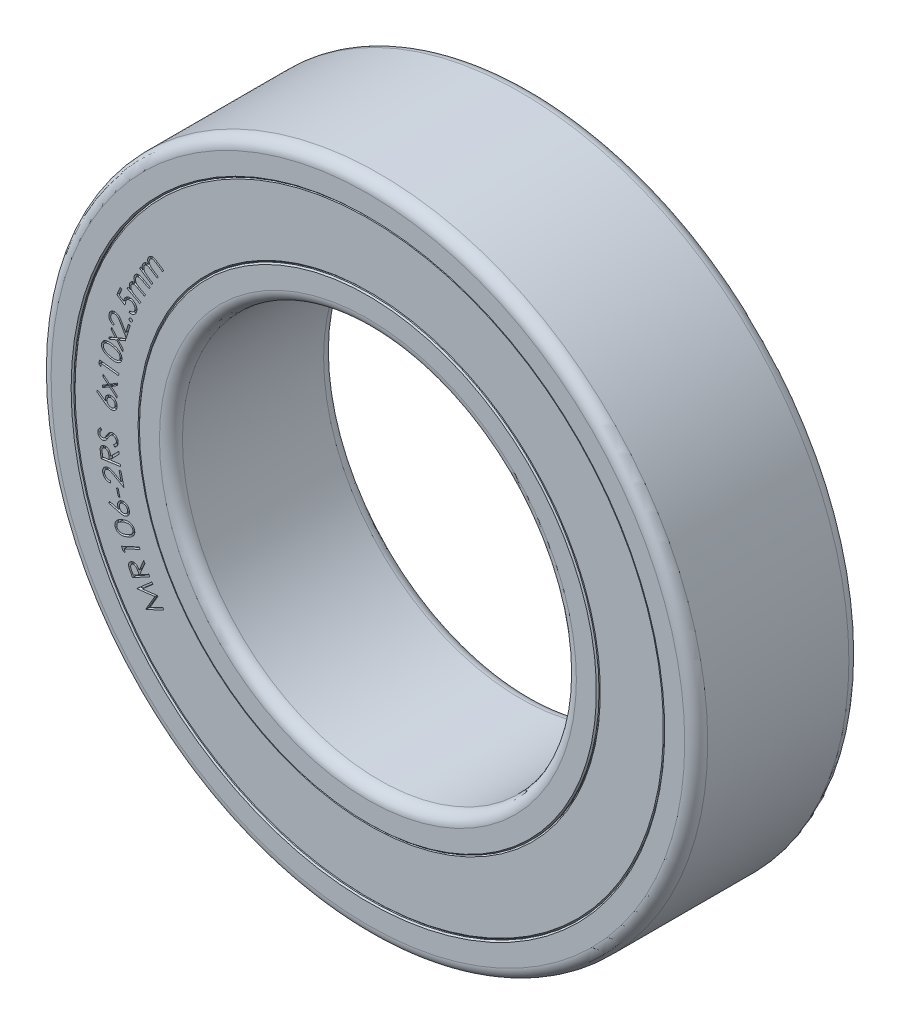
from build123d import *

# Parameters (mm, degrees)
SKETCH_R_INNER_BODY_W          = 2.5
SKETCH_R_INNER_BODY_H          = 0.5
FILLET_INNER_BODY_R            = 0.175
CHAMFER_INNER_BODY_SIZE        = 0.02
SKETCH_R_OUTER_BODY_W          = 2.5
SKETCH_R_OUTER_BODY_H          = 0.5
FILLET_OUTER_BODY_R            = 0.175
CHAMFER_OUTER_BODY_SIZE        = 0.02
SKETCH_R_SEAL_FACES_W          = 2.46
SKETCH_R_SEAL_FACES_H          = 1
CHAMFER_SEALS_SIZE             = 0.02
CUT_EXTRUDE_SEAL_LABEL_1_DEPTH = 0.05
CUT_EXTRUDE_SEAL_LABEL_2_DEPTH = 0.05


with BuildPart() as part:
    # Sketch R, INNER BODY → Revolve INNER BODY (revolve)
    with BuildSketch(Plane(origin=(0, 0, 0), x_dir=(0, 0, -1), z_dir=(1, 0, 0))):
        with Locations((0, 3.25)):
            Rectangle(SKETCH_R_INNER_BODY_W, SKETCH_R_INNER_BODY_H)
    revolve(axis=Axis((0, 0, 17.5), (0, 0, -1)))

    # Fillet INNER BODY
    fillet_inner_body_edges = [part.edges().sort_by_distance(p)[0] for p in [
        (0, -3, 1.25),
        (0, -3, -1.25),
    ]]
    fillet(fillet_inner_body_edges, radius=FILLET_INNER_BODY_R)

    # Chamfer INNER BODY
    chamfer_inner_body_edges = [part.edges().sort_by_distance(p)[0] for p in [
        (0, -3.5, -1.25),
        (0, -3.5, 1.25),
    ]]
    chamfer(chamfer_inner_body_edges, length=CHAMFER_INNER_BODY_SIZE)


with BuildPart() as body_2:
    # Sketch R, OUTER BODY → Revolve OUTER BODY (revolve)
    with BuildSketch(Plane(origin=(0, 0, 0), x_dir=(0, 0, -1), z_dir=(1, 0, 0))):
        with Locations((0, 4.75)):
            Rectangle(SKETCH_R_OUTER_BODY_W, SKETCH_R_OUTER_BODY_H)
    revolve(axis=Axis((0, 0, 17.5), (0, 0, -1)))

    # Fillet OUTER BODY
    fillet_outer_body_edges = [body_2.edges().sort_by_distance(p)[0] for p in [
        (0, -5, -1.25),
        (0, -5, 1.25),
    ]]
    fillet(fillet_outer_body_edges, radius=FILLET_OUTER_BODY_R)

    # Chamfer OUTER BODY
    chamfer_outer_body_edges = [body_2.edges().sort_by_distance(p)[0] for p in [
        (0, -4.5, 1.25),
        (0, -4.5, -1.25),
    ]]
    chamfer(chamfer_outer_body_edges, length=CHAMFER_OUTER_BODY_SIZE)


with BuildPart() as body_3:
    # Sketch R, SEAL FACES → Revolve SEALS (revolve)
    with BuildSketch(Plane(origin=(0, 0, 0), x_dir=(0, 0, -1), z_dir=(1, 0, 0))):
        with Locations((0, 4)):
            Rectangle(SKETCH_R_SEAL_FACES_W, SKETCH_R_SEAL_FACES_H)
    revolve(axis=Axis((0, 0, 17.5), (0, 0, -1)))

    # Chamfer SEALS
    chamfer_seals_edges = [body_3.edges().sort_by_distance(p)[0] for p in [
        (0, -3.5, -1.23),
        (0, -4.5, -1.23),
        (0, -4.5, 1.23),
        (0, -3.5, 1.23),
    ]]
    chamfer(chamfer_seals_edges, length=CHAMFER_SEALS_SIZE)

    # Sketch TEXT RADIUS 1 — MANUALLY ASSIGN TEXT AND FONT SIZE (FROM EQUATIONS) → Cut-Extrude SEAL LABEL 1 (cut)
    # profile 1 of 19: a face of its own
    with BuildSketch(Plane.XY.offset(1.23)):
        with BuildLine():
            Line((-3.496064182, 2.080945636), (-3.480559374, 2.104443232))
            Line((-3.480559374, 2.104443232), (-3.448768509, 2.083409578))
            add(Edge.make_bspline(
                [(-3.448768509, 2.083409578), (-3.450196387, 2.087274707), (-3.45293164, 2.09467877), (-3.455823091, 2.105652845), (-3.457601926, 2.115941756), (-3.457683602, 2.122585866), (-3.457722836, 2.125777367)],
                knots=[0, 0, 0, 0, 1.134130488, 2.172547028, 3.122182166, 4, 4, 4, 4], degree=3))
            add(Edge.make_bspline(
                [(-3.457722836, 2.125777367), (-3.457423493, 2.12986228), (-3.456834215, 2.137903716), (-3.453866561, 2.149519238), (-3.449680927, 2.160567169), (-3.445629928, 2.167257176), (-3.44360024, 2.170609097)],
                knots=[0, 0, 0, 0, 1.031488593, 2.030557184, 3.013242159, 4, 4, 4, 4], degree=3))
            add(Edge.make_bspline(
                [(-3.44360024, 2.170609097), (-3.442081731, 2.172766567), (-3.439068352, 2.177047923), (-3.433781521, 2.182852106), (-3.42793204, 2.188011743), (-3.421645309, 2.192583748), (-3.41504316, 2.196380087), (-3.408303242, 2.199430869), (-3.40152514, 2.20168497), (-3.394538497, 2.203048204), (-3.387132862, 2.203500823), (-3.379072148, 2.203128192), (-3.37025421, 2.201742081), (-3.364203313, 2.200281685), (-3.361028124, 2.199515347)],
                knots=[0, 0, 0, 0, 1.006296549, 1.99692937, 2.988152204, 3.979257063, 4.958970216, 5.889843987, 6.799015937, 7.67927223, 8.598866478, 9.624498946, 10.753463448, 12, 12, 12, 12], degree=3))
            add(Edge.make_bspline(
                [(-3.361028124, 2.199515347), (-3.36314015, 2.203816049), (-3.367250838, 2.212186614), (-3.371458127, 2.22520993), (-3.373926841, 2.238091714), (-3.374603923, 2.25079167), (-3.373533613, 2.263133086), (-3.370786497, 2.274937414), (-3.366498273, 2.28620573), (-3.362339504, 2.293061048), (-3.360246874, 2.29651054)],
                knots=[0, 0, 0, 0, 1.126652621, 2.19283248, 3.210124564, 4.206414252, 5.176779854, 6.115844831, 7.051921716, 8, 8, 8, 8], degree=3))
            add(Edge.make_bspline(
                [(-3.360246874, 2.29651054), (-3.358090053, 2.299546453), (-3.35387073, 2.305485518), (-3.346178673, 2.313039609), (-3.337719336, 2.319293173), (-3.328439471, 2.324088212), (-3.318580227, 2.32746602), (-3.308302226, 2.329314319), (-3.297703921, 2.329439711), (-3.288663763, 2.328296792), (-3.281163855, 2.326459975), (-3.275074839, 2.324528189), (-3.268623418, 2.321970148), (-3.26178718, 2.318815682), (-3.254508406, 2.315168103), (-3.246898194, 2.31086907), (-3.238869658, 2.306058741), (-3.233472394, 2.302538716), (-3.230679566, 2.30071727)],
                knots=[0, 0, 0, 0, 1.209107132, 2.365339032, 3.488504411, 4.619032666, 5.747983176, 6.866149784, 7.999845657, 9.181994191, 9.818753635, 10.508955219, 11.257785666, 12.074053349, 12.956813598, 13.904671436, 14.915766901, 16, 16, 16, 16], degree=3))
            Line((-3.230679566, 2.30071727), (-3.130258893, 2.234250924))
            Line((-3.130258893, 2.234250924), (-3.14624447, 2.21009227))
            Line((-3.14624447, 2.21009227), (-3.246665143, 2.276558617))
            add(Edge.make_bspline(
                [(-3.246665143, 2.276558617), (-3.249039942, 2.278115315), (-3.253595752, 2.281101682), (-3.260277138, 2.285162248), (-3.266425306, 2.288807761), (-3.272077676, 2.291934262), (-3.27728635, 2.294471396), (-3.281973779, 2.296525691), (-3.286169168, 2.29813546), (-3.291107617, 2.299479808), (-3.296968521, 2.300371001), (-3.303908763, 2.300231169), (-3.310809645, 2.299015748), (-3.317562263, 2.296645436), (-3.324104561, 2.293291579), (-3.330157901, 2.28877592), (-3.335688226, 2.283199726), (-3.338772375, 2.27885055), (-3.340355047, 2.276618713)],
                knots=[0, 0, 0, 0, 1.263601383, 2.424090069, 3.479074803, 4.444571111, 5.297804537, 6.05636361, 6.722068132, 7.295197716, 8.33156115, 9.348024679, 10.371073886, 11.436777009, 12.521330513, 13.630376321, 14.783996118, 16, 16, 16, 16], degree=3))
            add(Edge.make_bspline(
                [(-3.340355047, 2.276618713), (-3.342093491, 2.273722578), (-3.345550849, 2.267962843), (-3.349022743, 2.258482641), (-3.350963366, 2.248544104), (-3.351354408, 2.238313314), (-3.350295754, 2.228042523), (-3.347674402, 2.218043099), (-3.343601308, 2.20844051), (-3.338942647, 2.200808329), (-3.334240601, 2.194742318), (-3.329771939, 2.189928871), (-3.324524708, 2.184806749), (-3.318431429, 2.179445419), (-3.311432998, 2.173911848), (-3.303685542, 2.167976251), (-3.295016119, 2.161896984), (-3.288938658, 2.157779766), (-3.28578774, 2.155645155)],
                knots=[0, 0, 0, 0, 1.076317871, 2.140544581, 3.202713847, 4.297058087, 5.396527652, 6.486829287, 7.584214336, 8.7148521, 9.330070622, 10.031612176, 10.809356907, 11.670147146, 12.620838468, 13.656737815, 14.785113124, 16, 16, 16, 16], degree=3))
            Line((-3.28578774, 2.155645155), (-3.213792547, 2.107988905))
            Line((-3.213792547, 2.107988905), (-3.229357451, 2.084491309))
            Line((-3.229357451, 2.084491309), (-3.323528124, 2.14681102))
            add(Edge.make_bspline(
                [(-3.323528124, 2.14681102), (-3.326204239, 2.148566657), (-3.331325262, 2.151926251), (-3.338798605, 2.156542074), (-3.345625165, 2.160654274), (-3.351905766, 2.164146408), (-3.357590875, 2.167132068), (-3.362750551, 2.169439793), (-3.367269471, 2.17132157), (-3.372503742, 2.172906891), (-3.378663249, 2.173943751), (-3.38594868, 2.174210348), (-3.393138865, 2.173040864), (-3.400205552, 2.170899453), (-3.406942652, 2.167597914), (-3.41313866, 2.163138037), (-3.418755883, 2.157597012), (-3.421867717, 2.153252161), (-3.423468028, 2.151017751)],
                knots=[0, 0, 0, 0, 1.338462757, 2.561287409, 3.673342668, 4.670954362, 5.56646454, 6.357567117, 7.034294382, 7.612050215, 8.640902164, 9.638162029, 10.646445542, 11.671983619, 12.717314488, 13.768136562, 14.852228194, 16, 16, 16, 16], degree=3))
            add(Edge.make_bspline(
                [(-3.423468028, 2.151017751), (-3.425149598, 2.148242627), (-3.428493412, 2.142724272), (-3.431763577, 2.13352083), (-3.433716932, 2.123826892), (-3.434149764, 2.113721218), (-3.43323572, 2.103530961), (-3.430710605, 2.093556926), (-3.426773016, 2.083946111), (-3.422285773, 2.076252186), (-3.417772573, 2.07024688), (-3.413636283, 2.065566631), (-3.408894905, 2.060655449), (-3.403325897, 2.055743804), (-3.397185137, 2.050510032), (-3.390278745, 2.0452156), (-3.38270963, 2.039735291), (-3.377366146, 2.036156858), (-3.374609855, 2.03431102)],
                knots=[0, 0, 0, 0, 1.087989448, 2.16347442, 3.261868347, 4.400790967, 5.550228679, 6.688195994, 7.844512273, 9.030219224, 9.669725891, 10.366313351, 11.127972007, 11.962071958, 12.86018597, 13.839079786, 14.885347853, 16, 16, 16, 16], degree=3))
            Line((-3.374609855, 2.03431102), (-3.296665143, 1.98274852))
            Line((-3.296665143, 1.98274852), (-3.312169951, 1.959250924))
            Line((-3.312169951, 1.959250924), (-3.496064182, 2.080945636))
        make_face()
    # profile 2 of 19: a face of its own
    with BuildSketch(Plane.XY.offset(1.23)):
        with BuildLine():
            Line((-3.688462655, 1.719836113), (-3.675241501, 1.744896209))
            Line((-3.675241501, 1.744896209), (-3.64134727, 1.727047651))
            add(Edge.make_bspline(
                [(-3.64134727, 1.727047651), (-3.643152564, 1.730766471), (-3.646611351, 1.737891407), (-3.650599414, 1.748578454), (-3.653388494, 1.75869478), (-3.654145764, 1.76533487), (-3.654508328, 1.768513997)],
                knots=[0, 0, 0, 0, 1.132694241, 2.170143845, 3.123905433, 4, 4, 4, 4], degree=3))
            add(Edge.make_bspline(
                [(-3.654508328, 1.768513997), (-3.65460175, 1.772625414), (-3.654785786, 1.780724691), (-3.653098374, 1.792663095), (-3.649880357, 1.804109505), (-3.646518127, 1.811222652), (-3.644832847, 1.814788036)],
                knots=[0, 0, 0, 0, 1.0301386, 2.029319172, 3.012218675, 4, 4, 4, 4], degree=3))
            add(Edge.make_bspline(
                [(-3.644832847, 1.814788036), (-3.643513098, 1.817097839), (-3.640898781, 1.821673373), (-3.636251501, 1.828042802), (-3.630891379, 1.833743724), (-3.625125765, 1.838972373), (-3.618909128, 1.843454518), (-3.612446254, 1.847124887), (-3.605888387, 1.85006894), (-3.599018006, 1.852104368), (-3.591631302, 1.853284937), (-3.583516322, 1.853776828), (-3.574549673, 1.85327333), (-3.56834561, 1.85246988), (-3.565085251, 1.852047651)],
                knots=[0, 0, 0, 0, 1.009307436, 1.999356255, 2.983988612, 3.974737937, 4.949693083, 5.886205006, 6.791802456, 7.672313707, 8.597334252, 9.625623988, 10.752218054, 12, 12, 12, 12], degree=3))
            add(Edge.make_bspline(
                [(-3.565085251, 1.852047651), (-3.567636287, 1.856135736), (-3.572588047, 1.86407103), (-3.578077488, 1.876686576), (-3.581872956, 1.889290143), (-3.583833538, 1.901915692), (-3.583919707, 1.914354096), (-3.582457298, 1.926457661), (-3.579218968, 1.938172841), (-3.575734388, 1.945442029), (-3.573979482, 1.94910294)],
                knots=[0, 0, 0, 0, 1.127261396, 2.188102817, 3.210862582, 4.2028145, 5.169310942, 6.114914851, 7.050632802, 8, 8, 8, 8], degree=3))
            add(Edge.make_bspline(
                [(-3.573979482, 1.94910294), (-3.572130943, 1.952351107), (-3.568505873, 1.958720911), (-3.561549691, 1.967042949), (-3.553710306, 1.974155358), (-3.544903193, 1.979851037), (-3.53539012, 1.984192229), (-3.525306848, 1.987088422), (-3.514714287, 1.988233135), (-3.505572964, 1.987981654), (-3.497898598, 1.986951317), (-3.491608464, 1.985614778), (-3.484893652, 1.98363623), (-3.477681438, 1.981253152), (-3.470048323, 1.978286502), (-3.461981992, 1.97477314), (-3.453454763, 1.970763055), (-3.44768746, 1.967772756), (-3.444712655, 1.966230344)],
                knots=[0, 0, 0, 0, 1.206567809, 2.366134785, 3.489992131, 4.618395904, 5.743205047, 6.860846569, 7.995462687, 9.174926988, 9.808923693, 10.49755824, 11.252142082, 12.071567773, 12.953402696, 13.899298251, 14.916447007, 16, 16, 16, 16], degree=3))
            Line((-3.444712655, 1.966230344), (-3.337621309, 1.909739959))
            Line((-3.337621309, 1.909739959), (-3.35120304, 1.883958709))
            Line((-3.35120304, 1.883958709), (-3.458294386, 1.940449094))
            add(Edge.make_bspline(
                [(-3.458294386, 1.940449094), (-3.460836086, 1.94175574), (-3.465704269, 1.944258393), (-3.472746443, 1.947787105), (-3.479283323, 1.950787805), (-3.485278377, 1.953305947), (-3.490714332, 1.955403098), (-3.495624759, 1.956933871), (-3.499979145, 1.958144887), (-3.505051622, 1.959015368), (-3.511017437, 1.959254942), (-3.517982678, 1.958488209), (-3.52476949, 1.956516414), (-3.531322412, 1.953490153), (-3.537542162, 1.949494721), (-3.543115113, 1.94433702), (-3.548115863, 1.938214279), (-3.550788, 1.933541446), (-3.552164578, 1.93113419)],
                knots=[0, 0, 0, 0, 1.263031989, 2.419117241, 3.480773704, 4.440985358, 5.292713776, 6.05427588, 6.713510855, 7.288409474, 8.32515349, 9.340934049, 10.372144682, 11.433801145, 12.521601448, 13.624499383, 14.776237668, 16, 16, 16, 16], degree=3))
            add(Edge.make_bspline(
                [(-3.552164578, 1.93113419), (-3.553638695, 1.928051444), (-3.556551952, 1.9219591), (-3.558947874, 1.91210513), (-3.559953581, 1.902003945), (-3.559312983, 1.891732735), (-3.557239026, 1.881555519), (-3.553589718, 1.871823633), (-3.548524419, 1.862642074), (-3.543136185, 1.855444025), (-3.537801216, 1.849898484), (-3.532878908, 1.845508997), (-3.527131003, 1.84090286), (-3.520474721, 1.8361542), (-3.512959154, 1.831252045), (-3.504586303, 1.826134447), (-3.495337053, 1.820862991), (-3.488831511, 1.81737704), (-3.485457847, 1.815569286)],
                knots=[0, 0, 0, 0, 1.082557375, 2.139428226, 3.200311873, 4.296317681, 5.39420492, 6.487197407, 7.583313977, 8.714370998, 9.33076913, 10.024422614, 10.807286543, 11.668802151, 12.619802534, 13.656259296, 14.784575964, 16, 16, 16, 16], degree=3))
            Line((-3.485457847, 1.815569286), (-3.408654963, 1.775064478))
            Line((-3.408654963, 1.775064478), (-3.421876116, 1.750004382))
            Line((-3.421876116, 1.750004382), (-3.52229679, 1.802949094))
            add(Edge.make_bspline(
                [(-3.52229679, 1.802949094), (-3.52513448, 1.804444695), (-3.530579676, 1.807314577), (-3.538496382, 1.811220247), (-3.545813373, 1.814572957), (-3.552420838, 1.817566539), (-3.558460832, 1.819887085), (-3.563793454, 1.82179516), (-3.568512586, 1.823133385), (-3.573883578, 1.824282458), (-3.580168909, 1.82467625), (-3.58748826, 1.824221491), (-3.594582614, 1.822312632), (-3.601432156, 1.81946412), (-3.607862061, 1.815484058), (-3.613575037, 1.810346254), (-3.618753905, 1.804292073), (-3.621411191, 1.799595055), (-3.622777559, 1.797179863)],
                knots=[0, 0, 0, 0, 1.332550393, 2.557007429, 3.666575287, 4.676311746, 5.569554947, 6.353850975, 7.028287689, 7.606048592, 8.632383825, 9.633821459, 10.638986541, 11.66835379, 12.707497335, 13.762810017, 14.849644039, 16, 16, 16, 16], degree=3))
            add(Edge.make_bspline(
                [(-3.622777559, 1.797179863), (-3.624159435, 1.794232817), (-3.626913668, 1.788359023), (-3.62926626, 1.778850722), (-3.630237314, 1.768974097), (-3.629747045, 1.75882972), (-3.627792714, 1.748717057), (-3.624299415, 1.738997251), (-3.6194629, 1.729753139), (-3.614150854, 1.722573934), (-3.609050304, 1.716999613), (-3.604470714, 1.712683219), (-3.599164453, 1.70829717), (-3.593124499, 1.703886065), (-3.58645122, 1.699271497), (-3.578979093, 1.694709664), (-3.57087791, 1.689920329), (-3.565157506, 1.686861783), (-3.562200636, 1.685280824)],
                knots=[0, 0, 0, 0, 1.085638814, 2.16380016, 3.253621219, 4.392982688, 5.545757842, 6.682855174, 7.832788627, 9.020492654, 9.655468174, 10.356338279, 11.121793676, 11.95463376, 12.855241244, 13.832417776, 14.879579463, 16, 16, 16, 16], degree=3))
            Line((-3.562200636, 1.685280824), (-3.479087655, 1.641470728))
            Line((-3.479087655, 1.641470728), (-3.492308809, 1.616410632))
            Line((-3.492308809, 1.616410632), (-3.688462655, 1.719836113))
        make_face()
    # profile 3 of 19: a face of its own
    with BuildSketch(Plane.XY.offset(1.23)):
        with BuildLine():
            Line((-3.793071033, 1.680103176), (-3.766748918, 1.669045484))
            Line((-3.766748918, 1.669045484), (-3.80797488, 1.570607984))
            Line((-3.80797488, 1.570607984), (-3.738383533, 1.525415676))
            add(Edge.make_bspline(
                [(-3.738383533, 1.525415676), (-3.737969861, 1.528688805), (-3.737171278, 1.535007498), (-3.735245771, 1.54406298), (-3.733066757, 1.552438812), (-3.731058449, 1.557642572), (-3.730090264, 1.560151253)],
                knots=[0, 0, 0, 0, 1.104760579, 2.132712517, 3.099799456, 4, 4, 4, 4], degree=3))
            add(Edge.make_bspline(
                [(-3.730090264, 1.560151253), (-3.728726383, 1.563205449), (-3.726054559, 1.569188575), (-3.721120362, 1.577517933), (-3.715648761, 1.585156356), (-3.709503828, 1.592027848), (-3.702721905, 1.598136652), (-3.695347721, 1.603506428), (-3.687373144, 1.608180052), (-3.678810002, 1.611968863), (-3.669905401, 1.614989406), (-3.66077587, 1.617016549), (-3.651540633, 1.618213644), (-3.642173326, 1.618278742), (-3.632691672, 1.61751626), (-3.623099628, 1.615733309), (-3.613373603, 1.61304401), (-3.607012655, 1.610531406), (-3.603768149, 1.609249811)],
                knots=[0, 0, 0, 0, 1.056033878, 2.06875537, 3.052424712, 4.020558919, 4.975047214, 5.930793622, 6.897955069, 7.889492593, 8.884176071, 9.863764966, 10.839523205, 11.820583016, 12.817619445, 13.840513958, 14.898518333, 16, 16, 16, 16], degree=3))
            add(Edge.make_bspline(
                [(-3.603768149, 1.609249811), (-3.601528282, 1.608281951), (-3.597098988, 1.606368026), (-3.590783926, 1.6029262), (-3.584690906, 1.599318889), (-3.578983754, 1.595227025), (-3.573488015, 1.590943252), (-3.568368925, 1.586217424), (-3.563567057, 1.581165366), (-3.559068922, 1.575829256), (-3.554938267, 1.570280264), (-3.55124802, 1.564534796), (-3.548011926, 1.558644338), (-3.545168351, 1.55263614), (-3.542802925, 1.546472743), (-3.540960214, 1.540152573), (-3.539507766, 1.533690615), (-3.538477255, 1.527107038), (-3.537959075, 1.520417615), (-3.537819125, 1.513673068), (-3.538184126, 1.506884419), (-3.539042486, 1.500040239), (-3.540352689, 1.493150707), (-3.542184464, 1.486239283), (-3.544401002, 1.479265997), (-3.546227462, 1.474684077), (-3.547157572, 1.472350772)],
                knots=[0, 0, 0, 0, 1.057852548, 2.091883038, 3.117150554, 4.127283044, 5.135582568, 6.138024201, 7.145986695, 8.157314432, 9.163552566, 10.144562353, 11.116836074, 12.076958093, 13.025847453, 13.977160646, 14.930020272, 15.897194041, 16.864875113, 17.838235434, 18.821513099, 19.810914779, 20.828309012, 21.861024312, 22.91074451, 24, 24, 24, 24], degree=3))
            add(Edge.make_bspline(
                [(-3.547157572, 1.472350772), (-3.548374226, 1.469624035), (-3.550764904, 1.464266097), (-3.555070945, 1.456737808), (-3.559818285, 1.449773796), (-3.56512726, 1.443426357), (-3.57100144, 1.437714232), (-3.577297825, 1.432512547), (-3.584154635, 1.427978885), (-3.591453558, 1.424108121), (-3.5990561, 1.420878924), (-3.606845344, 1.418308205), (-3.614785993, 1.416593644), (-3.622848185, 1.415550032), (-3.631054611, 1.415264352), (-3.639401527, 1.415674069), (-3.647886634, 1.416888723), (-3.653497178, 1.418238443), (-3.656352283, 1.418925291)],
                knots=[0, 0, 0, 0, 1.073349513, 2.109091508, 3.114312924, 4.101373804, 5.079586206, 6.05745362, 7.034604132, 8.030565179, 9.024856988, 10.002299634, 10.976017663, 11.942055331, 12.922573372, 13.925313011, 14.944228985, 16, 16, 16, 16], degree=3))
            Line((-3.656352283, 1.418925291), (-3.644453245, 1.447290676))
            add(Edge.make_bspline(
                [(-3.644453245, 1.447290676), (-3.641656179, 1.446794964), (-3.636268771, 1.445840178), (-3.628349933, 1.445344214), (-3.620955821, 1.445721805), (-3.614031668, 1.447082818), (-3.607468705, 1.449267023), (-3.601190801, 1.452311794), (-3.59512644, 1.456143687), (-3.589355677, 1.460728316), (-3.584036635, 1.465989078), (-3.579324118, 1.471778113), (-3.575290771, 1.478056411), (-3.573245241, 1.482578898), (-3.572217668, 1.484850772)],
                knots=[0, 0, 0, 0, 1.150678726, 2.216314013, 3.208521523, 4.143251297, 5.067590725, 6.00453955, 6.964186829, 7.969759228, 8.985994295, 9.990320265, 10.99043631, 12, 12, 12, 12], degree=3))
            add(Edge.make_bspline(
                [(-3.572217668, 1.484850772), (-3.571350114, 1.487098747), (-3.569633607, 1.491546497), (-3.567887291, 1.498439012), (-3.566939151, 1.505372448), (-3.566669113, 1.512323408), (-3.567244335, 1.519291632), (-3.568509276, 1.526276482), (-3.570513397, 1.533303962), (-3.573258773, 1.540264071), (-3.576679325, 1.547008923), (-3.58060824, 1.553420903), (-3.585253, 1.559261279), (-3.590337293, 1.564722206), (-3.596128514, 1.56959658), (-3.602449339, 1.574059585), (-3.609373354, 1.578042064), (-3.61430423, 1.580245762), (-3.616809014, 1.581365195)],
                knots=[0, 0, 0, 0, 0.976402387, 1.9318698, 2.874965931, 3.809629471, 4.746584332, 5.704121053, 6.683727809, 7.704883963, 8.732898021, 9.747149903, 10.748076679, 11.753606952, 12.767663667, 13.811061766, 14.888064228, 16, 16, 16, 16], degree=3))
            add(Edge.make_bspline(
                [(-3.616809014, 1.581365195), (-3.619098588, 1.582266704), (-3.623596239, 1.584037632), (-3.630475012, 1.585965559), (-3.637258062, 1.587180868), (-3.643945457, 1.587664566), (-3.650527614, 1.587481209), (-3.657042269, 1.58666104), (-3.663437711, 1.585063562), (-3.669690019, 1.58285551), (-3.675688084, 1.579965656), (-3.681367845, 1.576485833), (-3.686603012, 1.572345132), (-3.691532039, 1.567711315), (-3.695976314, 1.56238476), (-3.699981966, 1.556456179), (-3.703710776, 1.549989053), (-3.70577324, 1.545348392), (-3.706833053, 1.542963753)],
                knots=[0, 0, 0, 0, 1.0709331, 2.103747045, 3.104724937, 4.06674979, 5.017877893, 5.967805328, 6.919812958, 7.882667876, 8.850213042, 9.813660426, 10.776831371, 11.751662313, 12.754576591, 13.790075897, 14.864413748, 16, 16, 16, 16], degree=3))
            add(Edge.make_bspline(
                [(-3.706833053, 1.542963753), (-3.707669038, 1.540852365), (-3.709389892, 1.536506131), (-3.711363026, 1.529569425), (-3.713140629, 1.522159435), (-3.714480251, 1.514223359), (-3.715564119, 1.505783507), (-3.716344527, 1.496822929), (-3.716767727, 1.487338973), (-3.716755288, 1.480844761), (-3.716748918, 1.477519041)],
                knots=[0, 0, 0, 0, 0.817686704, 1.683185812, 2.595248185, 3.562279631, 4.581012569, 5.660468889, 6.801913845, 8, 8, 8, 8], degree=3))
            Line((-3.716748918, 1.477519041), (-3.84313113, 1.560451734))
            Line((-3.84313113, 1.560451734), (-3.793071033, 1.680103176))
        make_face()
    # profile 4 of 19: a face of its own
    with BuildSketch(Plane.XY.offset(1.23)):
        with BuildLine():
            add(Edge.make_bspline(
                [(-3.655679088, 1.340930016), (-3.655013319, 1.342461053), (-3.6537121, 1.345453406), (-3.650830852, 1.349418594), (-3.64710911, 1.352549945), (-3.642868141, 1.355098707), (-3.638182367, 1.356734724), (-3.633309226, 1.357531213), (-3.628358983, 1.357148947), (-3.625195475, 1.35615746), (-3.623587741, 1.355653574)],
                knots=[0, 0, 0, 0, 1.018635479, 1.990883168, 2.963053752, 3.973116696, 4.999377018, 5.97777337, 6.972279848, 8, 8, 8, 8], degree=3))
            add(Edge.make_bspline(
                [(-3.623587741, 1.355653574), (-3.622055315, 1.354988944), (-3.619060248, 1.35368995), (-3.615103972, 1.350784709), (-3.611880569, 1.347098076), (-3.609395571, 1.342804085), (-3.607704266, 1.33814294), (-3.606948551, 1.333304288), (-3.607240531, 1.328399131), (-3.60819777, 1.32527101), (-3.608683895, 1.32368242)],
                knots=[0, 0, 0, 0, 1.021310224, 1.996110851, 2.97891819, 4.002218627, 5.019610813, 6.00057625, 6.984609607, 8, 8, 8, 8], degree=3))
            add(Edge.make_bspline(
                [(-3.608683895, 1.32368242), (-3.609350336, 1.322152143), (-3.61065287, 1.319161278), (-3.613533605, 1.315172865), (-3.61732114, 1.31206599), (-3.621590174, 1.309517604), (-3.626307002, 1.307926971), (-3.631156605, 1.3072376), (-3.636058447, 1.307511884), (-3.639186623, 1.308471519), (-3.640775241, 1.308958862)],
                knots=[0, 0, 0, 0, 1.020419313, 1.994369602, 2.977544567, 3.999952357, 5.023977534, 6.002320389, 6.985495354, 8, 8, 8, 8], degree=3))
            add(Edge.make_bspline(
                [(-3.640775241, 1.308958862), (-3.6423339, 1.309614626), (-3.645401268, 1.310905139), (-3.649316057, 1.313937916), (-3.652622947, 1.317572533), (-3.655094031, 1.32186089), (-3.656723296, 1.326535542), (-3.657397498, 1.331353016), (-3.657120944, 1.336232173), (-3.656166687, 1.339341325), (-3.655679088, 1.340930016)],
                knots=[0, 0, 0, 0, 1.031319076, 2.029588204, 3.002217279, 4.024454828, 5.036712599, 6.01489255, 6.985664279, 8, 8, 8, 8], degree=3))
        make_face()
    # profile 5 of 19: a face of its own
    with BuildSketch(Plane.XY.offset(1.23)):
        with BuildLine():
            Line((-3.885656931, 1.15513208), (-3.894310777, 1.127848426))
            add(Edge.make_bspline(
                [(-3.894310777, 1.127848426), (-3.897697619, 1.129117942), (-3.904340497, 1.131607945), (-3.913768861, 1.136173852), (-3.92240928, 1.141517558), (-3.930356706, 1.147446858), (-3.937587745, 1.154067319), (-3.944072771, 1.161333631), (-3.949842418, 1.169280443), (-3.954766714, 1.17782173), (-3.958900959, 1.186727066), (-3.96214947, 1.195849282), (-3.964266022, 1.205134109), (-3.965593567, 1.214523498), (-3.965801218, 1.22403651), (-3.965058729, 1.23367243), (-3.963401485, 1.243443323), (-3.961541731, 1.249879062), (-3.960596835, 1.253148906)],
                knots=[0, 0, 0, 0, 1.098860716, 2.155281432, 3.17748585, 4.18198842, 5.164424436, 6.151808835, 7.136957311, 8.143542364, 9.143181292, 10.117434619, 11.080246227, 12.032490992, 12.9946865, 13.965414571, 14.966276254, 16, 16, 16, 16], degree=3))
            add(Edge.make_bspline(
                [(-3.960596835, 1.253148906), (-3.959517395, 1.256338427), (-3.957408734, 1.262569086), (-3.953247585, 1.271340824), (-3.948532699, 1.279410859), (-3.943122359, 1.286750373), (-3.937127403, 1.293409889), (-3.930372541, 1.29923684), (-3.923098384, 1.30447947), (-3.915152655, 1.308780573), (-3.906967179, 1.312445692), (-3.89858177, 1.315214154), (-3.890186013, 1.317236675), (-3.881722357, 1.318308274), (-3.873228711, 1.318550597), (-3.864689011, 1.317959673), (-3.856100288, 1.316437182), (-3.850468422, 1.314836834), (-3.847616065, 1.31402631)],
                knots=[0, 0, 0, 0, 1.126761937, 2.201104426, 3.244594435, 4.252213395, 5.249462534, 6.238328423, 7.234155129, 8.24603013, 9.258171929, 10.233982155, 11.198870994, 12.145752861, 13.08528742, 14.040214307, 15.007432224, 16, 16, 16, 16], degree=3))
            add(Edge.make_bspline(
                [(-3.847616065, 1.31402631), (-3.843665178, 1.312628253), (-3.835847617, 1.309861939), (-3.824926352, 1.30388425), (-3.814827719, 1.296667691), (-3.8071548, 1.289416384), (-3.801178598, 1.282798856), (-3.796452669, 1.276926336), (-3.791392567, 1.270287521), (-3.786214707, 1.262726827), (-3.780635376, 1.254437521), (-3.774922984, 1.24524314), (-3.768885012, 1.235262235), (-3.764888663, 1.228277967), (-3.762820392, 1.22466333)],
                knots=[0, 0, 0, 0, 1.191778283, 2.358153366, 3.53120479, 4.717756731, 5.355875353, 6.069484674, 6.863532412, 7.732275115, 8.678365984, 9.708701342, 10.81416128, 12, 12, 12, 12], degree=3))
            Line((-3.762820392, 1.22466333), (-3.708914142, 1.12965131))
            Line((-3.708914142, 1.12965131), (-3.667207412, 1.261021503))
            Line((-3.667207412, 1.261021503), (-3.639743469, 1.25230756))
            Line((-3.639743469, 1.25230756), (-3.701101642, 1.05903833))
            Line((-3.701101642, 1.05903833), (-3.784034335, 1.205011887))
            add(Edge.make_bspline(
                [(-3.784034335, 1.205011887), (-3.786048518, 1.208562767), (-3.789918858, 1.215385935), (-3.795631935, 1.22512036), (-3.800967425, 1.233976183), (-3.805990205, 1.2418962), (-3.810716047, 1.248883369), (-3.814978653, 1.255039338), (-3.81904302, 1.260211022), (-3.823821368, 1.265942507), (-3.829989294, 1.271950402), (-3.837957492, 1.277939277), (-3.846563365, 1.282790893), (-3.852708117, 1.285022667), (-3.855789142, 1.286141695)],
                knots=[0, 0, 0, 0, 1.323422595, 2.543013431, 3.658975165, 4.675044364, 5.582822794, 6.393620998, 7.101594776, 7.714417049, 8.811993281, 9.883516346, 10.938779235, 12, 12, 12, 12], degree=3))
            add(Edge.make_bspline(
                [(-3.855789142, 1.286141695), (-3.857762779, 1.286703773), (-3.861670089, 1.287816546), (-3.867656814, 1.288751639), (-3.873615652, 1.289146415), (-3.879537375, 1.288818296), (-3.885425084, 1.287929378), (-3.891271996, 1.286328463), (-3.897107936, 1.284164727), (-3.902843067, 1.281412076), (-3.908322702, 1.278144908), (-3.913404168, 1.274409846), (-3.917993043, 1.270221269), (-3.922184839, 1.265648298), (-3.925829111, 1.260581594), (-3.929046041, 1.255110382), (-3.931821613, 1.249240888), (-3.93325133, 1.245090977), (-3.933974239, 1.242992656)],
                knots=[0, 0, 0, 0, 0.991007225, 1.961947629, 2.922209499, 3.872264924, 4.822566982, 5.794858059, 6.796590375, 7.827241382, 8.865007443, 9.875822256, 10.869663095, 11.863503934, 12.868599345, 13.879831381, 14.927978282, 16, 16, 16, 16], degree=3))
            add(Edge.make_bspline(
                [(-3.933974239, 1.242992656), (-3.934646671, 1.240761248), (-3.935970725, 1.236367492), (-3.937043348, 1.229664256), (-3.937657315, 1.223092335), (-3.937432257, 1.216626847), (-3.936664266, 1.210264666), (-3.935235159, 1.203984441), (-3.933017786, 1.197852556), (-3.930285767, 1.191824977), (-3.926836084, 1.186059298), (-3.922804431, 1.180574971), (-3.918150104, 1.175420017), (-3.912813714, 1.170706757), (-3.906969155, 1.166205266), (-3.900437908, 1.162126995), (-3.893282978, 1.158417275), (-3.888235352, 1.156242828), (-3.885656931, 1.15513208)],
                knots=[0, 0, 0, 0, 1.000987472, 1.970995262, 2.91306542, 3.835075686, 4.746402185, 5.665753149, 6.597449252, 7.54556417, 8.507237316, 9.480604715, 10.46849853, 11.487119431, 12.53800582, 13.637303289, 14.793090569, 16, 16, 16, 16], degree=3))
        make_face()
    # profile 6 of 19: a face of its own
    with BuildSketch(Plane.XY.offset(1.23)):
        Polygon((-3.967210451, 0.911878719), (-3.959157567, 0.9449917), (-3.866008528, 0.982551796), (-3.931693625, 1.058573431), (-3.92364074, 1.091746508), (-3.839506125, 0.993729681), (-3.706873913, 1.049078239), (-3.714986894, 1.015544585), (-3.821056605, 0.971674393), (-3.746537375, 0.885196027), (-3.754530163, 0.852263335), (-3.847438817, 0.960796989), align=None)
    # profile 7 of 19: a face of its own
    with BuildSketch(Plane.XY.offset(1.23)):
        with BuildLine():
            add(Edge.make_bspline(
                [(-3.942273816, 0.669772937), (-3.946969276, 0.670760015), (-3.956072732, 0.672673742), (-3.969203523, 0.676029244), (-3.98145297, 0.679456673), (-3.992799564, 0.683195489), (-4.003242473, 0.687154328), (-4.012822505, 0.691257542), (-4.021468427, 0.69566598), (-4.029252076, 0.700294921), (-4.036297896, 0.705186444), (-4.042804324, 0.710190246), (-4.048713098, 0.715530057), (-4.054123626, 0.721022188), (-4.058970445, 0.72676593), (-4.063242529, 0.732750504), (-4.067047521, 0.738911036), (-4.070235512, 0.745318585), (-4.072869753, 0.751855155), (-4.074985083, 0.758483148), (-4.076556474, 0.765174293), (-4.077574509, 0.771926167), (-4.078085408, 0.77873982), (-4.077911285, 0.785609513), (-4.077359773, 0.792546905), (-4.076527738, 0.797142043), (-4.07610795, 0.799460437)],
                knots=[0, 0, 0, 0, 1.647629881, 3.19438916, 4.653459305, 6.015352329, 7.295633127, 8.488057561, 9.592621996, 10.626173742, 11.595594529, 12.536875692, 13.443007034, 14.328426482, 15.182861486, 16.020993943, 16.851638873, 17.666957412, 18.475631122, 19.269776576, 20.054087033, 20.833433449, 21.612779866, 22.397180835, 23.19132629, 24, 24, 24, 24], degree=3))
            add(Edge.make_bspline(
                [(-4.07610795, 0.799460437), (-4.075582904, 0.801793563), (-4.074540238, 0.806426814), (-4.072357311, 0.813156409), (-4.069715013, 0.819610314), (-4.066569432, 0.825776121), (-4.062939326, 0.831658554), (-4.058930603, 0.837355838), (-4.054333385, 0.842695991), (-4.049270252, 0.847757343), (-4.043758999, 0.852495516), (-4.037781533, 0.856856803), (-4.031316164, 0.860731515), (-4.024467854, 0.864329483), (-4.017095261, 0.867346667), (-4.009314804, 0.870063504), (-4.001098429, 0.872421947), (-3.992378279, 0.874258414), (-3.983141823, 0.875749662), (-3.973298887, 0.876560065), (-3.962846689, 0.876751711), (-3.951775695, 0.876535106), (-3.940083447, 0.875676659), (-3.927781852, 0.874192203), (-3.914870201, 0.872226983), (-3.906090412, 0.87052527), (-3.90158872, 0.869652744)],
                knots=[0, 0, 0, 0, 0.815237443, 1.618943365, 2.409327677, 3.191490806, 3.976512903, 4.765123724, 5.564666772, 6.376231955, 7.204673058, 8.0409642, 8.896265328, 9.773201924, 10.676564182, 11.609936151, 12.58306455, 13.589368015, 14.647400458, 15.771875076, 16.954075967, 18.211406736, 19.547018225, 20.950297722, 22.436315332, 24, 24, 24, 24], degree=3))
            add(Edge.make_bspline(
                [(-3.90158872, 0.869652744), (-3.897115621, 0.868697907), (-3.888399329, 0.866837307), (-3.875777474, 0.863677477), (-3.863965536, 0.86015801), (-3.852910561, 0.856487984), (-3.842647251, 0.852437813), (-3.833170469, 0.848141955), (-3.824477657, 0.843571211), (-3.816559386, 0.838737739), (-3.809315609, 0.8336766), (-3.802676176, 0.82837065), (-3.796608055, 0.82283613), (-3.791062072, 0.817139), (-3.786076083, 0.811209788), (-3.781714617, 0.805015244), (-3.777834261, 0.798651133), (-3.774602269, 0.792077238), (-3.771885865, 0.785391246), (-3.769708971, 0.778625406), (-3.768172377, 0.771779723), (-3.767040168, 0.764921131), (-3.766591661, 0.757981514), (-3.766627613, 0.750987872), (-3.767310289, 0.743938306), (-3.768125024, 0.739259514), (-3.768535835, 0.736900341)],
                knots=[0, 0, 0, 0, 1.561202171, 3.042162317, 4.439815771, 5.767472984, 7.016917543, 8.204173992, 9.317536339, 10.367108115, 11.368697388, 12.33192715, 13.266104389, 14.17037366, 15.044112778, 15.907354049, 16.754025058, 17.585792891, 18.404786849, 19.215720182, 20.008578683, 20.797742922, 21.585988303, 22.379200549, 23.182749102, 24, 24, 24, 24], degree=3))
            add(Edge.make_bspline(
                [(-3.768535835, 0.736900341), (-3.769065145, 0.734608328), (-3.770114954, 0.730062461), (-3.772236458, 0.723430229), (-3.774793013, 0.717064334), (-3.777899421, 0.711008374), (-3.781456569, 0.70522277), (-3.785478973, 0.699682962), (-3.790005489, 0.6944601), (-3.794954731, 0.689507857), (-3.800323715, 0.68487638), (-3.806216449, 0.680737077), (-3.812463642, 0.676927171), (-3.819189925, 0.673566796), (-3.826303206, 0.670555314), (-3.833893199, 0.668045992), (-3.841873885, 0.665878582), (-3.850338549, 0.664130361), (-3.859385219, 0.662827688), (-3.869107627, 0.662247229), (-3.879556542, 0.662029264), (-3.890706048, 0.662504513), (-3.902598351, 0.663452701), (-3.915174458, 0.665073556), (-3.928515215, 0.667076843), (-3.937592584, 0.668855617), (-3.942273816, 0.669772937)],
                knots=[0, 0, 0, 0, 0.808447427, 1.603435811, 2.391232294, 3.164321626, 3.940350238, 4.724163048, 5.515233958, 6.313883091, 7.129602004, 7.949409905, 8.786819318, 9.643048012, 10.531998774, 11.440163183, 12.389089465, 13.373731208, 14.410028987, 15.528284537, 16.719906684, 18.001786936, 19.362984266, 20.82028714, 22.360210642, 24, 24, 24, 24], degree=3))
        make_face()
        with BuildLine():
            add(Edge.make_bspline(
                [(-3.936023816, 0.697357071), (-3.932021336, 0.6965743), (-3.924253337, 0.695055099), (-3.912909064, 0.69320276), (-3.902250203, 0.691736333), (-3.892288799, 0.690717262), (-3.883028291, 0.690065672), (-3.874484747, 0.689981444), (-3.866635349, 0.690148497), (-3.859414251, 0.690905628), (-3.852690879, 0.691981404), (-3.846362256, 0.693412756), (-3.84039224, 0.695239984), (-3.834715979, 0.697328429), (-3.829360776, 0.699781971), (-3.824370346, 0.702619808), (-3.819696397, 0.705759218), (-3.814026266, 0.710342098), (-3.807839826, 0.716637162), (-3.801771085, 0.72487494), (-3.797290435, 0.733777616), (-3.795668534, 0.740107184), (-3.79485795, 0.743270533)],
                knots=[0, 0, 0, 0, 1.474621537, 2.861940246, 4.155775899, 5.364489339, 6.482340934, 7.511022971, 8.453126386, 9.319476967, 10.134010854, 10.914195597, 11.663506276, 12.390064319, 13.099855486, 13.790767439, 14.463791531, 15.133494149, 16.424264437, 17.642748736, 18.821908569, 20, 20, 20, 20], degree=3))
            add(Edge.make_bspline(
                [(-3.79485795, 0.743270533), (-3.794364293, 0.746527319), (-3.793382711, 0.753003061), (-3.793926051, 0.762947333), (-3.796222109, 0.772805981), (-3.79940934, 0.780893688), (-3.802796634, 0.787195226), (-3.80581165, 0.791853849), (-3.809317215, 0.796313218), (-3.813298647, 0.80057164), (-3.817723045, 0.804679657), (-3.822565753, 0.808635013), (-3.827905696, 0.812381898), (-3.831683509, 0.814685757), (-3.83361997, 0.815866687)],
                knots=[0, 0, 0, 0, 1.342975221, 2.670350543, 4.038228904, 5.463697359, 6.206973983, 6.9583163, 7.727758419, 8.521071172, 9.337515967, 10.19258559, 11.073541282, 12, 12, 12, 12], degree=3))
            add(Edge.make_bspline(
                [(-3.83361997, 0.815866687), (-3.836086237, 0.817301914), (-3.841116455, 0.820229217), (-3.84912884, 0.824067657), (-3.857545858, 0.827739752), (-3.866410763, 0.831198537), (-3.875793673, 0.834290279), (-3.885639303, 0.837158651), (-3.895929034, 0.839840827), (-3.902984145, 0.841316949), (-3.9065767, 0.84206861)],
                knots=[0, 0, 0, 0, 0.879047516, 1.792912504, 2.735658712, 3.708975696, 4.724112453, 5.779015716, 6.869045517, 8, 8, 8, 8], degree=3))
            add(Edge.make_bspline(
                [(-3.9065767, 0.84206861), (-3.91017789, 0.842775517), (-3.917221255, 0.844158117), (-3.927631113, 0.84575177), (-3.937585894, 0.847042303), (-3.947108376, 0.847892224), (-3.956190998, 0.84832253), (-3.96485545, 0.848337061), (-3.973077751, 0.847912014), (-3.980861366, 0.847140794), (-3.988206407, 0.846006143), (-3.995133316, 0.844512378), (-4.001616585, 0.842658194), (-4.00766994, 0.840468551), (-4.013329566, 0.838052272), (-4.018539452, 0.83518296), (-4.023343529, 0.832031048), (-4.029029229, 0.827413847), (-4.035187389, 0.821170115), (-4.041182916, 0.812971754), (-4.045660777, 0.804165881), (-4.047290989, 0.797896348), (-4.048103143, 0.794772937)],
                knots=[0, 0, 0, 0, 1.32683195, 2.595075721, 3.807030949, 4.955941311, 6.050839986, 7.093861628, 8.087475303, 9.026581453, 9.920904746, 10.773328836, 11.587182871, 12.357009926, 13.099818255, 13.809689382, 14.504773019, 15.174446474, 16.454917441, 17.663230942, 18.835847584, 20, 20, 20, 20], degree=3))
            add(Edge.make_bspline(
                [(-4.048103143, 0.794772937), (-4.048601452, 0.791535998), (-4.04959849, 0.785059385), (-4.048967067, 0.775091692), (-4.046615397, 0.765155), (-4.04336156, 0.757006), (-4.03999599, 0.750588979), (-4.036899921, 0.745910049), (-4.033429421, 0.741387308), (-4.029442445, 0.737093901), (-4.025105191, 0.732895778), (-4.020257484, 0.728932629), (-4.015018377, 0.725142422), (-4.009292234, 0.721489864), (-4.002939356, 0.717954016), (-3.995743093, 0.714717029), (-3.987816697, 0.711421749), (-3.979012484, 0.708432806), (-3.969460723, 0.70537371), (-3.959028627, 0.702615829), (-3.947826983, 0.699808395), (-3.94003664, 0.698190469), (-3.936023816, 0.697357071)],
                knots=[0, 0, 0, 0, 1.18098483, 2.362968004, 3.581852661, 4.859142506, 5.523131201, 6.197888512, 6.884353478, 7.581315054, 8.313598601, 9.06450894, 9.842237334, 10.649663918, 11.518180259, 12.467363564, 13.499977928, 14.619714954, 15.826518631, 17.124510915, 18.518828899, 20, 20, 20, 20], degree=3))
        make_face(mode=Mode.SUBTRACT)
    # profile 8 of 19: a face of its own
    with BuildSketch(Plane.XY.offset(1.23)):
        Polygon((-4.115927149, 0.50987965), (-4.109136284, 0.567992631), (-3.813523303, 0.533257054), (-3.816948784, 0.503870035), (-4.083595418, 0.535180131), (-4.089064168, 0.4887859), align=None)
    # profile 9 of 19: a face of its own
    with BuildSketch(Plane.XY.offset(1.23)):
        Polygon((-4.06501384, 0.221913767), (-4.062609994, 0.255988286), (-3.976672494, 0.308572421), (-4.054196532, 0.372815209), (-4.051792686, 0.406889729), (-3.952333552, 0.323957036), (-3.830398456, 0.400639729), (-3.832862398, 0.366144536), (-3.930398456, 0.305267133), (-3.842477782, 0.232070017), (-3.844941725, 0.198175786), (-3.954737398, 0.290062806), align=None)
    # profile 10 of 19: a face of its own
    with BuildSketch(Plane.XY.offset(1.23)):
        with BuildLine():
            Line((-4.151800984, 0.129675473), (-4.135094253, 0.153774031))
            Line((-4.135094253, 0.153774031), (-4.015082234, 0.070060089))
            add(Edge.make_bspline(
                [(-4.015082234, 0.070060089), (-4.015844438, 0.072734365), (-4.017328463, 0.077941226), (-4.018819231, 0.085739375), (-4.019720998, 0.093255135), (-4.019753744, 0.098182716), (-4.019769734, 0.100588935)],
                knots=[0, 0, 0, 0, 1.07565453, 2.094318046, 3.069424092, 4, 4, 4, 4], degree=3))
            add(Edge.make_bspline(
                [(-4.019769734, 0.100588935), (-4.019633149, 0.103499924), (-4.019364008, 0.109236027), (-4.017864843, 0.117627564), (-4.015652137, 0.125664738), (-4.012629935, 0.13334033), (-4.008819036, 0.140648691), (-4.004226624, 0.147612133), (-3.998778696, 0.154172434), (-3.992614246, 0.160292808), (-3.985965939, 0.165959055), (-3.97875572, 0.170738002), (-3.971283208, 0.174877898), (-3.96345296, 0.178199957), (-3.955242135, 0.180656349), (-3.94672088, 0.182418786), (-3.937818413, 0.183312563), (-3.931790688, 0.183331636), (-3.928724061, 0.183341339)],
                knots=[0, 0, 0, 0, 1.019415146, 2.008757321, 2.977015969, 3.934314725, 4.891125175, 5.857934771, 6.84936312, 7.871019722, 8.896569096, 9.902283892, 10.894183506, 11.884221561, 12.873787465, 13.890303107, 14.926683949, 16, 16, 16, 16], degree=3))
            add(Edge.make_bspline(
                [(-3.928724061, 0.183341339), (-3.924524055, 0.183092764), (-3.916267365, 0.182604097), (-3.904273956, 0.179958602), (-3.892973065, 0.175821669), (-3.882394654, 0.17030075), (-3.87266754, 0.16343444), (-3.86400481, 0.155260991), (-3.856510302, 0.145812577), (-3.850110059, 0.135349323), (-3.845022359, 0.124065041), (-3.841458561, 0.112250387), (-3.839379001, 0.100043294), (-3.839327175, 0.091782808), (-3.839300984, 0.087608166)],
                knots=[0, 0, 0, 0, 1.036198774, 2.037038444, 3.015279433, 3.99626025, 4.970715138, 5.942122986, 6.922618664, 7.935827487, 8.959482037, 9.965828449, 10.971980875, 12, 12, 12, 12], degree=3))
            add(Edge.make_bspline(
                [(-3.839300984, 0.087608166), (-3.839530774, 0.083588237), (-3.839985568, 0.075632118), (-3.842611753, 0.063972964), (-3.846646861, 0.052805498), (-3.85211242, 0.042231248), (-3.858889164, 0.032501564), (-3.866896589, 0.023777643), (-3.876187606, 0.016308426), (-3.886474575, 0.010037714), (-3.897507101, 0.005109295), (-3.909024259, 0.001692389), (-3.920872818, -0.000415998), (-3.928895663, -0.000467096), (-3.932930792, -0.000492796)],
                knots=[0, 0, 0, 0, 1.011008397, 2.000956961, 2.992006905, 3.989982849, 4.984852522, 5.965078871, 6.957037173, 7.972052654, 8.986705645, 9.985850298, 10.986973558, 12, 12, 12, 12], degree=3))
            add(Edge.make_bspline(
                [(-3.932930792, -0.000492796), (-3.936021888, -0.000311725), (-3.942300893, 5.6088e-05), (-3.95179791, 0.001743428), (-3.961473781, 0.004355088), (-3.969661231, 0.007244302), (-3.976386858, 0.010100002), (-3.981765132, 0.012635584), (-3.987357062, 0.015580432), (-3.993243342, 0.018840932), (-3.999343196, 0.022509381), (-4.005713376, 0.026539101), (-4.012327096, 0.030925159), (-4.016771537, 0.034032826), (-4.01904858, 0.035624993)],
                knots=[0, 0, 0, 0, 1.17533957, 2.387490878, 3.655481606, 4.979099408, 5.681481485, 6.430302373, 7.236893293, 8.081630458, 8.985950938, 9.9401159, 10.944649281, 12, 12, 12, 12], degree=3))
            Line((-4.01904858, 0.035624993), (-4.151800984, 0.129675473))
        make_face()
        with BuildLine():
            add(Edge.make_bspline(
                [(-3.993808195, 0.092836531), (-3.99381253, 0.090710975), (-3.993821105, 0.086506421), (-3.993063519, 0.080329919), (-3.991812678, 0.074365249), (-3.989934784, 0.068624128), (-3.987457032, 0.063098458), (-3.984447144, 0.057765099), (-3.980807472, 0.052718547), (-3.976678314, 0.047918985), (-3.972112617, 0.043530048), (-3.967230364, 0.039651324), (-3.962080781, 0.036394182), (-3.956695455, 0.033656156), (-3.951029759, 0.031502307), (-3.945120122, 0.02986649), (-3.938936294, 0.028815685), (-3.934717755, 0.02862879), (-3.932570215, 0.028533647)],
                knots=[0, 0, 0, 0, 1.031761795, 2.040924309, 3.016298495, 3.988803998, 4.969021184, 5.954009484, 6.95860999, 7.986739539, 9.026046728, 10.030694371, 11.010718297, 11.981274108, 12.960863058, 13.950120899, 14.956463993, 16, 16, 16, 16], degree=3))
            add(Edge.make_bspline(
                [(-3.932570215, 0.028533647), (-3.930445427, 0.028536249), (-3.926244616, 0.028541395), (-3.920059239, 0.029198325), (-3.914099138, 0.030473776), (-3.908359143, 0.032348129), (-3.902842463, 0.034808098), (-3.897549875, 0.037853795), (-3.892511259, 0.041472115), (-3.887711681, 0.045602701), (-3.883340105, 0.050162914), (-3.879437921, 0.055016109), (-3.876100924, 0.060134037), (-3.873422746, 0.065561724), (-3.871231557, 0.071188393), (-3.869593592, 0.077060094), (-3.868553942, 0.083205617), (-3.868363721, 0.08740385), (-3.86826733, 0.089531243)],
                knots=[0, 0, 0, 0, 1.033788758, 2.04385187, 3.021142242, 3.995558296, 4.977701182, 5.956158352, 6.962732462, 7.992881837, 9.034230814, 10.033219479, 11.020431835, 12.001606138, 12.974019781, 13.955823772, 14.964143892, 16, 16, 16, 16], degree=3))
            add(Edge.make_bspline(
                [(-3.86826733, 0.089531243), (-3.868262976, 0.09165681), (-3.868254364, 0.095861386), (-3.869012221, 0.102037725), (-3.870262071, 0.108002991), (-3.872143644, 0.113741902), (-3.874600454, 0.119259978), (-3.877651565, 0.124548037), (-3.881258392, 0.129614671), (-3.885463006, 0.134345379), (-3.8899578, 0.138803958), (-3.894865503, 0.14264733), (-3.899990299, 0.145974611), (-3.905352628, 0.148762174), (-3.910975136, 0.150940537), (-3.916863569, 0.152493814), (-3.923000656, 0.153537096), (-3.927197591, 0.153774091), (-3.929325022, 0.153894223)],
                knots=[0, 0, 0, 0, 1.033663016, 2.044685107, 3.021856609, 3.996154143, 4.978177569, 5.956515727, 6.962967405, 7.999385636, 9.033600283, 10.040099184, 11.027191463, 12.00397377, 12.976269136, 13.955384293, 14.963581769, 16, 16, 16, 16], degree=3))
            add(Edge.make_bspline(
                [(-3.929325022, 0.153894223), (-3.931470662, 0.153899504), (-3.935695337, 0.153909901), (-3.941910998, 0.153144627), (-3.947914157, 0.151895466), (-3.953687697, 0.150046899), (-3.959198158, 0.147528725), (-3.964521096, 0.144513305), (-3.969641869, 0.140920846), (-3.974378949, 0.13669727), (-3.978835244, 0.132202009), (-3.98268641, 0.127312461), (-3.985950098, 0.122168397), (-3.988671519, 0.116795693), (-3.990840659, 0.111177665), (-3.992482846, 0.105308152), (-3.993521346, 0.099162033), (-3.993711724, 0.094963882), (-3.993808195, 0.092836531)],
                knots=[0, 0, 0, 0, 1.04157174, 2.050811567, 3.035779163, 4.017616277, 4.989026851, 5.974090612, 6.986703639, 8.021294837, 9.053686335, 10.058410946, 11.038509952, 12.009140119, 12.97972149, 13.959675515, 14.966095705, 16, 16, 16, 16], degree=3))
        make_face(mode=Mode.SUBTRACT)
    # profile 11 of 19: a face of its own
    with BuildSketch(Plane.XY.offset(1.23)):
        with BuildLine():
            Line((-3.877078588, -0.467491487), (-3.894506472, -0.443753506))
            add(Edge.make_bspline(
                [(-3.894506472, -0.443753506), (-3.890858225, -0.441186327), (-3.88388609, -0.436280212), (-3.874534231, -0.428330901), (-3.86680812, -0.420188751), (-3.860486581, -0.41202264), (-3.855836733, -0.403621138), (-3.852737843, -0.395133256), (-3.851001247, -0.386488475), (-3.851278568, -0.380719034), (-3.85141753, -0.377828026)],
                knots=[0, 0, 0, 0, 1.294306561, 2.473538588, 3.555126059, 4.54698731, 5.462929388, 6.32919962, 7.162779052, 8, 8, 8, 8], degree=3))
            add(Edge.make_bspline(
                [(-3.85141753, -0.377828026), (-3.851738978, -0.375393104), (-3.852379464, -0.370541508), (-3.854383886, -0.363507892), (-3.857264831, -0.356803265), (-3.86088874, -0.350506208), (-3.865170776, -0.344737741), (-3.870099967, -0.339761326), (-3.875509205, -0.335559466), (-3.881455309, -0.332353113), (-3.887597676, -0.329864411), (-3.893929922, -0.328306277), (-3.900359827, -0.327511907), (-3.904661619, -0.327762187), (-3.906826184, -0.327888122)],
                knots=[0, 0, 0, 0, 1.065602439, 2.12321952, 3.163918831, 4.227921879, 5.271925178, 6.274695345, 7.261333699, 8.234804187, 9.199291605, 10.131941045, 11.060034599, 12, 12, 12, 12], degree=3))
            add(Edge.make_bspline(
                [(-3.906826184, -0.327888122), (-3.909290965, -0.328241515), (-3.914271485, -0.328955608), (-3.921495238, -0.331682529), (-3.928556981, -0.33552502), (-3.932817627, -0.338973302), (-3.93501128, -0.340748699)],
                knots=[0, 0, 0, 0, 0.947069389, 1.913718354, 2.92584866, 4, 4, 4, 4], degree=3))
            add(Edge.make_bspline(
                [(-3.93501128, -0.340748699), (-3.936595069, -0.342148825), (-3.939931075, -0.345097973), (-3.944745547, -0.350214171), (-3.949884997, -0.355949666), (-3.955071997, -0.362540915), (-3.960489713, -0.369810384), (-3.96605502, -0.377837299), (-3.971923816, -0.386522763), (-3.975718909, -0.392677289), (-3.977679549, -0.395856872)],
                knots=[0, 0, 0, 0, 0.725007705, 1.527116597, 2.408483478, 3.367116567, 4.403683597, 5.519220673, 6.718366859, 8, 8, 8, 8], degree=3))
            add(Edge.make_bspline(
                [(-3.977679549, -0.395856872), (-3.979631937, -0.399008649), (-3.983369218, -0.405041813), (-3.988878784, -0.413557368), (-3.994022641, -0.421146789), (-3.998659865, -0.427888866), (-4.002971949, -0.433662999), (-4.006920221, -0.438478043), (-4.01032344, -0.442513123), (-4.012676389, -0.444693525), (-4.013737242, -0.445676583)],
                knots=[0, 0, 0, 0, 1.443326668, 2.762831039, 3.948137683, 5.012521943, 5.948351106, 6.752209957, 7.437420409, 8, 8, 8, 8], degree=3))
            add(Edge.make_bspline(
                [(-4.013737242, -0.445676583), (-4.015361263, -0.4470813), (-4.018579621, -0.449865058), (-4.023666132, -0.453591787), (-4.028945176, -0.456763295), (-4.034298006, -0.459608775), (-4.039913419, -0.461769031), (-4.045612754, -0.463623766), (-4.051499333, -0.46487738), (-4.055479821, -0.465376694), (-4.057487242, -0.465628506)],
                knots=[0, 0, 0, 0, 1.05276876, 2.086295419, 3.087042479, 4.071210959, 5.054447484, 6.033109532, 7.008066853, 8, 8, 8, 8], degree=3))
            add(Edge.make_bspline(
                [(-4.057487242, -0.465628506), (-4.060651953, -0.465809111), (-4.066872553, -0.46616411), (-4.076143903, -0.465304065), (-4.085064376, -0.463169169), (-4.09362985, -0.459935627), (-4.101626503, -0.455552533), (-4.108917032, -0.450074733), (-4.115457026, -0.443575564), (-4.121178117, -0.436153842), (-4.126013725, -0.427996075), (-4.12965146, -0.419221415), (-4.132324193, -0.41000842), (-4.133150622, -0.403645289), (-4.133568972, -0.400424179)],
                knots=[0, 0, 0, 0, 1.019705952, 2.004348224, 2.985370669, 3.965353389, 4.944018957, 5.911609856, 6.892292921, 7.903866414, 8.92167311, 9.936408998, 10.955380174, 12, 12, 12, 12], degree=3))
            add(Edge.make_bspline(
                [(-4.133568972, -0.400424179), (-4.133755713, -0.396978878), (-4.134126681, -0.390134666), (-4.133150071, -0.379911478), (-4.130737124, -0.369954518), (-4.127728292, -0.361845838), (-4.124587619, -0.355383086), (-4.121502326, -0.350470015), (-4.118037823, -0.345345629), (-4.114008239, -0.340123639), (-4.109386974, -0.334832249), (-4.104311853, -0.329363889), (-4.098616556, -0.323832677), (-4.094596765, -0.320164721), (-4.092523299, -0.318272737)],
                knots=[0, 0, 0, 0, 1.295598, 2.573750818, 3.843001813, 5.136673076, 5.816862833, 6.539995609, 7.314788938, 8.141580505, 9.017061544, 9.954641445, 10.9449749, 12, 12, 12, 12], degree=3))
            Line((-4.092523299, -0.318272737), (-4.071910319, -0.340688603))
            add(Edge.make_bspline(
                [(-4.071910319, -0.340688603), (-4.073541802, -0.342201833), (-4.076700116, -0.345131224), (-4.081136749, -0.34953086), (-4.085190456, -0.35368169), (-4.088643428, -0.357773302), (-4.09182079, -0.361494046), (-4.09440536, -0.365141795), (-4.096569796, -0.368553278), (-4.098917855, -0.372776077), (-4.100984565, -0.378097907), (-4.102675499, -0.384609069), (-4.103329209, -0.39134039), (-4.103097278, -0.395857157), (-4.10298003, -0.398140526)],
                knots=[0, 0, 0, 0, 1.176510572, 2.277551435, 3.303913806, 4.242574971, 5.107844906, 5.889741742, 6.603840036, 7.243777423, 8.441646477, 9.610550993, 10.792057588, 12, 12, 12, 12], degree=3))
            add(Edge.make_bspline(
                [(-4.10298003, -0.398140526), (-4.1025849, -0.400988803), (-4.101822242, -0.406486378), (-4.098972835, -0.414156533), (-4.094905151, -0.420897509), (-4.089599317, -0.426568671), (-4.083363128, -0.430919178), (-4.076547396, -0.433983687), (-4.069167229, -0.435470685), (-4.064142548, -0.43526494), (-4.06157378, -0.435159756)],
                knots=[0, 0, 0, 0, 1.109286524, 2.141078885, 3.13880965, 4.13626973, 5.120557944, 6.060468803, 7.008453171, 8, 8, 8, 8], degree=3))
            add(Edge.make_bspline(
                [(-4.06157378, -0.435159756), (-4.059987099, -0.434945524), (-4.056806299, -0.434516056), (-4.05211086, -0.433399071), (-4.047580056, -0.43166627), (-4.043081535, -0.429495456), (-4.03865397, -0.426524155), (-4.034108049, -0.422804593), (-4.029434567, -0.41824642), (-4.026468521, -0.414753508), (-4.024915126, -0.412924179)],
                knots=[0, 0, 0, 0, 0.870513027, 1.745106606, 2.617254145, 3.503976719, 4.455769606, 5.508961996, 6.695378469, 8, 8, 8, 8], degree=3))
            add(Edge.make_bspline(
                [(-4.024915126, -0.412924179), (-4.024410107, -0.412246115), (-4.02320803, -0.410632149), (-4.021216227, -0.407697614), (-4.018723414, -0.4038839), (-4.015722411, -0.399193631), (-4.012224287, -0.393652402), (-4.008261818, -0.387219309), (-4.003822186, -0.379870802), (-4.000677068, -0.374682554), (-3.999013684, -0.371938603)],
                knots=[0, 0, 0, 0, 0.418360374, 0.995805224, 1.754675235, 2.673141982, 3.751279702, 4.997560297, 6.412075011, 8, 8, 8, 8], degree=3))
            add(Edge.make_bspline(
                [(-3.999013684, -0.371938603), (-3.996981143, -0.368646795), (-3.993039557, -0.36226319), (-3.987140964, -0.353102021), (-3.981212642, -0.344801063), (-3.975468455, -0.337238896), (-3.969887573, -0.330413745), (-3.964400774, -0.32436676), (-3.959040897, -0.319086833), (-3.952127152, -0.313203584), (-3.943406501, -0.307184465), (-3.932652322, -0.301565502), (-3.921655623, -0.297681886), (-3.914144127, -0.296581145), (-3.910431953, -0.29603716)],
                knots=[0, 0, 0, 0, 1.150039025, 2.230201559, 3.23807341, 4.181321211, 5.052781535, 5.85789694, 6.607429629, 7.287541263, 8.554446763, 9.74758323, 10.886857705, 12, 12, 12, 12], degree=3))
            add(Edge.make_bspline(
                [(-3.910431953, -0.29603716), (-3.907788526, -0.295860516), (-3.902560618, -0.295511167), (-3.894766448, -0.295977046), (-3.887157296, -0.297134039), (-3.879775977, -0.29925951), (-3.872526985, -0.301974301), (-3.865557914, -0.305640916), (-3.858747793, -0.310007356), (-3.852247977, -0.315118145), (-3.846137142, -0.320788788), (-3.84063474, -0.326924606), (-3.835883004, -0.333501735), (-3.831794689, -0.340467589), (-3.828524484, -0.347861835), (-3.82589704, -0.355639092), (-3.824040061, -0.363820669), (-3.823344593, -0.369447066), (-3.822992049, -0.372299179)],
                knots=[0, 0, 0, 0, 0.986142471, 1.950294926, 2.90241426, 3.847605582, 4.80671903, 5.78138575, 6.775067732, 7.817121915, 8.857383995, 9.877534137, 10.882197596, 11.87548714, 12.881037229, 13.888772849, 14.929784243, 16, 16, 16, 16], degree=3))
            add(Edge.make_bspline(
                [(-3.822992049, -0.372299179), (-3.822818379, -0.374521205), (-3.822474498, -0.378920986), (-3.822548158, -0.385492826), (-3.823109712, -0.391953821), (-3.824037155, -0.398309859), (-3.825511787, -0.404551841), (-3.827407565, -0.410671193), (-3.829868896, -0.416647206), (-3.832663859, -0.422567755), (-3.836078225, -0.42840005), (-3.840115253, -0.434152329), (-3.844760075, -0.43986977), (-3.850010515, -0.445518225), (-3.855855915, -0.451132973), (-3.862383883, -0.456630731), (-3.869453524, -0.46218239), (-3.874496205, -0.465693453), (-3.877078588, -0.467491487)],
                knots=[0, 0, 0, 0, 0.924701743, 1.830980082, 2.723733415, 3.615014387, 4.494309826, 5.383105521, 6.270850652, 7.174493734, 8.09852245, 9.071844016, 10.088550315, 11.153440793, 12.270694105, 13.450246232, 14.694257962, 16, 16, 16, 16], degree=3))
        make_face()
    # profile 12 of 19: a face of its own
    with BuildSketch(Plane.XY.offset(1.23)):
        with BuildLine():
            Line((-4.083421239, -0.722489532), (-4.091774605, -0.663595301))
            add(Edge.make_bspline(
                [(-4.091774605, -0.663595301), (-4.092321567, -0.659649824), (-4.093367688, -0.652103693), (-4.094771708, -0.64127071), (-4.095865434, -0.631414126), (-4.096642237, -0.622515811), (-4.097191535, -0.614581943), (-4.097520934, -0.607629644), (-4.09754951, -0.601652185), (-4.097339286, -0.598009828), (-4.097243355, -0.596347705)],
                knots=[0, 0, 0, 0, 1.414776885, 2.705906605, 3.879789211, 4.936877566, 5.878250408, 6.704367602, 7.408761851, 8, 8, 8, 8], degree=3))
            add(Edge.make_bspline(
                [(-4.097243355, -0.596347705), (-4.097025905, -0.594117752), (-4.096595909, -0.589708136), (-4.095209624, -0.583274775), (-4.093497828, -0.577052524), (-4.091255194, -0.571085583), (-4.088569312, -0.565359597), (-4.085319891, -0.559937474), (-4.081753385, -0.554668208), (-4.077593455, -0.549765534), (-4.073029982, -0.545229664), (-4.068178165, -0.541008635), (-4.062833525, -0.537451281), (-4.057226546, -0.534200635), (-4.051209494, -0.531531356), (-4.044845515, -0.529281735), (-4.038127348, -0.527538803), (-4.033488444, -0.526780213), (-4.031137585, -0.526395782)],
                knots=[0, 0, 0, 0, 1.028202428, 2.033216694, 3.017681397, 3.990034473, 4.957150422, 5.918076273, 6.890385823, 7.876354018, 8.86519395, 9.844140503, 10.824037699, 11.80884626, 12.817727272, 13.84197062, 14.906374855, 16, 16, 16, 16], degree=3))
            add(Edge.make_bspline(
                [(-4.031137585, -0.526395782), (-4.027216352, -0.525962609), (-4.019541106, -0.525114736), (-4.008163207, -0.525772417), (-3.997316329, -0.527872727), (-3.987066439, -0.531491344), (-3.977514695, -0.536534411), (-3.968882489, -0.543074786), (-3.961174537, -0.550950499), (-3.95570238, -0.558667445), (-3.951741331, -0.56552781), (-3.948983618, -0.571319961), (-3.946490719, -0.577641803), (-3.94412162, -0.584492237), (-3.941967499, -0.591886756), (-3.940140111, -0.599865074), (-3.938442614, -0.608340405), (-3.937507638, -0.614192678), (-3.937027008, -0.61720107)],
                knots=[0, 0, 0, 0, 1.272065781, 2.489884422, 3.663345249, 4.829491268, 5.986993714, 7.137116239, 8.312714584, 9.53164938, 10.180738641, 10.869334706, 11.600860337, 12.374123582, 13.209351696, 14.086439497, 15.01632389, 16, 16, 16, 16], degree=3))
            Line((-3.937027008, -0.61720107), (-3.814731335, -0.491299628))
            Line((-3.814731335, -0.491299628), (-3.80950297, -0.527898186))
            Line((-3.80950297, -0.527898186), (-3.931858739, -0.653559244))
            Line((-3.931858739, -0.653559244), (-3.929454893, -0.670446263))
            Line((-3.929454893, -0.670446263), (-3.792014989, -0.650854917))
            Line((-3.792014989, -0.650854917), (-3.787808258, -0.680422224))
            Line((-3.787808258, -0.680422224), (-4.083421239, -0.722489532))
        make_face()
        with BuildLine():
            Line((-4.058661624, -0.688835686), (-3.958180855, -0.674532801))
            Line((-3.958180855, -0.674532801), (-3.965031816, -0.623631359))
            add(Edge.make_bspline(
                [(-3.965031816, -0.623631359), (-3.965370401, -0.621243887), (-3.966024031, -0.616634922), (-3.967327519, -0.610015297), (-3.968635374, -0.6039014), (-3.96998729, -0.598269075), (-3.971557699, -0.593160692), (-3.973230656, -0.58855068), (-3.974963547, -0.58442147), (-3.977411515, -0.579663023), (-3.980946164, -0.57445297), (-3.985830087, -0.568975485), (-3.991598975, -0.564563591), (-3.997958232, -0.561027066), (-4.004781699, -0.558438994), (-4.011933698, -0.556932952), (-4.019307172, -0.556412361), (-4.024249065, -0.556912069), (-4.026750566, -0.557165013)],
                knots=[0, 0, 0, 0, 1.119652848, 2.16146693, 3.132196358, 4.023443533, 4.850366721, 5.612590447, 6.300322432, 6.928603792, 8.094863172, 9.214400068, 10.321616262, 11.45019999, 12.583680979, 13.696705278, 14.834111722, 16, 16, 16, 16], degree=3))
            add(Edge.make_bspline(
                [(-4.026750566, -0.557165013), (-4.029174855, -0.557586793), (-4.033964882, -0.558420166), (-4.040727348, -0.561033944), (-4.047047236, -0.564492698), (-4.052740332, -0.56893505), (-4.057786841, -0.574033502), (-4.061856872, -0.579780954), (-4.065040742, -0.585978407), (-4.066867121, -0.591615453), (-4.067810802, -0.596544576), (-4.068276995, -0.600783901), (-4.068502292, -0.605519498), (-4.068491185, -0.610773386), (-4.068239891, -0.616546264), (-4.067752265, -0.622838887), (-4.067026977, -0.629652157), (-4.066386448, -0.634350074), (-4.066053451, -0.636792417)],
                knots=[0, 0, 0, 0, 1.163426619, 2.298754286, 3.416085764, 4.566547597, 5.707574101, 6.803207757, 7.889883498, 8.997456789, 9.596846565, 10.265571692, 11.016355389, 11.842110001, 12.754078115, 13.75356695, 14.832129487, 16, 16, 16, 16], degree=3))
            Line((-4.066053451, -0.636792417), (-4.058661624, -0.688835686))
        make_face(mode=Mode.SUBTRACT)
    # profile 13 of 19: a face of its own
    with BuildSketch(Plane.XY.offset(1.23)):
        with BuildLine():
            Line((-3.942836144, -0.943724801), (-3.936225567, -0.97154932))
            add(Edge.make_bspline(
                [(-3.936225567, -0.97154932), (-3.939782728, -0.97219128), (-3.946743637, -0.973447515), (-3.95718311, -0.97426845), (-3.967321039, -0.974248336), (-3.977207233, -0.973219764), (-3.986767388, -0.97123414), (-3.996068322, -0.968316585), (-4.005067981, -0.964473571), (-4.013694885, -0.959731339), (-4.021795513, -0.954228484), (-4.0291814, -0.948025729), (-4.035878652, -0.941267597), (-4.041707531, -0.933813678), (-4.046853427, -0.92580109), (-4.051177181, -0.917152841), (-4.054773555, -0.907922557), (-4.05646164, -0.901456944), (-4.057319317, -0.898171916)],
                knots=[0, 0, 0, 0, 1.099426852, 2.151437254, 3.181709485, 4.180776273, 5.170725116, 6.148264046, 7.14244594, 8.143723569, 9.139642157, 10.117656188, 11.074659162, 12.029601763, 12.991832925, 13.967849978, 14.967511759, 16, 16, 16, 16], degree=3))
            add(Edge.make_bspline(
                [(-4.057319317, -0.898171916), (-4.058026312, -0.894897725), (-4.059413668, -0.888472689), (-4.060332605, -0.878842086), (-4.060417576, -0.869508706), (-4.059603716, -0.860456411), (-4.057763472, -0.85168117), (-4.055075758, -0.843189095), (-4.051413996, -0.835004824), (-4.046926952, -0.827185675), (-4.041735867, -0.819856284), (-4.0360125, -0.81314742), (-4.029801273, -0.807155716), (-4.023084526, -0.801930044), (-4.015962015, -0.797289732), (-4.008303706, -0.793480022), (-4.000209069, -0.790286478), (-3.994557085, -0.788819033), (-3.991694317, -0.788075762)],
                knots=[0, 0, 0, 0, 1.122465342, 2.202644772, 3.237179585, 4.249201448, 5.243885223, 6.238137914, 7.230550719, 8.24457716, 9.256643612, 10.238105604, 11.197808345, 12.145206697, 13.08806916, 14.04341254, 15.008975042, 16, 16, 16, 16], degree=3))
            add(Edge.make_bspline(
                [(-3.991694317, -0.788075762), (-3.98760237, -0.787274242), (-3.979491697, -0.785685543), (-3.967113559, -0.78507975), (-3.954807581, -0.786233278), (-3.944521263, -0.78838935), (-3.936036514, -0.791055359), (-3.928946679, -0.79359039), (-3.921252697, -0.796796966), (-3.912899109, -0.80052874), (-3.90389042, -0.804814371), (-3.894275637, -0.809748409), (-3.883966322, -0.815217071), (-3.876942833, -0.819151063), (-3.873304894, -0.821188743)],
                knots=[0, 0, 0, 0, 1.188921256, 2.356567712, 3.521650233, 4.707929561, 5.348068387, 6.058735859, 6.856032325, 7.726146388, 8.669728133, 9.702652142, 10.810048333, 12, 12, 12, 12], degree=3))
            Line((-3.873304894, -0.821188743), (-3.778352971, -0.874914705))
            Line((-3.778352971, -0.874914705), (-3.810023644, -0.741020474))
            Line((-3.810023644, -0.741020474), (-3.782018836, -0.734409897))
            Line((-3.782018836, -0.734409897), (-3.735444317, -0.931405089))
            Line((-3.735444317, -0.931405089), (-3.881357778, -0.84889307))
            add(Edge.make_bspline(
                [(-3.881357778, -0.84889307), (-3.884899701, -0.846883355), (-3.891700896, -0.843024302), (-3.901546336, -0.837575403), (-3.910702765, -0.832864567), (-3.91904564, -0.828613619), (-3.926666442, -0.825019016), (-3.933526988, -0.821980309), (-3.939641033, -0.819570109), (-3.946696107, -0.817156895), (-3.955051217, -0.815173643), (-3.964939169, -0.814051826), (-3.97482584, -0.814311968), (-3.981249642, -0.815568395), (-3.984482778, -0.816200762)],
                knots=[0, 0, 0, 0, 1.321817643, 2.538152912, 3.651963014, 4.66386892, 5.577133537, 6.386516204, 7.098888611, 7.709553579, 8.805610754, 9.878335147, 10.932153762, 12, 12, 12, 12], degree=3))
            add(Edge.make_bspline(
                [(-3.984482778, -0.816200762), (-3.986480783, -0.816715482), (-3.990404513, -0.8177263), (-3.996000669, -0.820030742), (-4.001273169, -0.822754436), (-4.006194437, -0.826057607), (-4.010790719, -0.829820279), (-4.014921217, -0.834240501), (-4.018877694, -0.839012003), (-4.022300098, -0.844347899), (-4.02530112, -0.84997331), (-4.027772998, -0.855773478), (-4.02960902, -0.861711729), (-4.03072572, -0.867785502), (-4.031341658, -0.873977786), (-4.031347214, -0.880300001), (-4.030674457, -0.886740632), (-4.029773944, -0.891007176), (-4.029314509, -0.893183935)],
                knots=[0, 0, 0, 0, 0.998530143, 1.960937131, 2.924664529, 3.869489121, 4.827579921, 5.795452402, 6.795867455, 7.826886126, 8.860231898, 9.88230397, 10.87700623, 11.864914419, 12.869276268, 13.888348686, 14.922651155, 16, 16, 16, 16], degree=3))
            add(Edge.make_bspline(
                [(-4.029314509, -0.893183935), (-4.028713976, -0.89544013), (-4.027534154, -0.899872703), (-4.025099284, -0.906203395), (-4.022220136, -0.912137206), (-4.018798859, -0.917637497), (-4.014766872, -0.92263992), (-4.010342659, -0.927292486), (-4.005352675, -0.931465017), (-3.999906732, -0.935186483), (-3.993993412, -0.938357127), (-3.987738032, -0.941040828), (-3.981075545, -0.943003863), (-3.974094292, -0.944383099), (-3.966754314, -0.945156541), (-3.959075823, -0.945339576), (-3.951043135, -0.94482854), (-3.945616785, -0.944098763), (-3.942836144, -0.943724801)],
                knots=[0, 0, 0, 0, 1.004201641, 1.972878005, 2.913645757, 3.839361529, 4.753564733, 5.674248856, 6.598156392, 7.54745727, 8.507966156, 9.481502483, 10.471579418, 11.491095885, 12.54025302, 13.644057694, 14.792737235, 16, 16, 16, 16], degree=3))
        make_face()
    # profile 14 of 19: a face of its own
    with BuildSketch(Plane.XY.offset(1.23)):
        Polygon((-3.819811645, -1.096848598), (-3.849198665, -0.989396675), (-3.825340492, -0.98290629), (-3.795953472, -1.090358213), align=None)
    # profile 15 of 19: a face of its own
    with BuildSketch(Plane.XY.offset(1.23)):
        with BuildLine():
            Line((-3.962916852, -1.249779852), (-3.955645218, -1.221474563))
            Line((-3.955645218, -1.221474563), (-3.814599544, -1.258493794))
            add(Edge.make_bspline(
                [(-3.814599544, -1.258493794), (-3.816234703, -1.25625248), (-3.819417324, -1.251890057), (-3.823531622, -1.245136802), (-3.82687914, -1.238371271), (-3.828598968, -1.233769701), (-3.829443294, -1.231510621)],
                knots=[0, 0, 0, 0, 1.076218495, 2.094717419, 3.064626626, 4, 4, 4, 4], degree=3))
            add(Edge.make_bspline(
                [(-3.829443294, -1.231510621), (-3.830298795, -1.228740489), (-3.831984879, -1.223280911), (-3.833547446, -1.214941721), (-3.834210047, -1.206662904), (-3.834026107, -1.198448019), (-3.833026497, -1.190300515), (-3.831043131, -1.182240508), (-3.828285446, -1.174216495), (-3.82462992, -1.166360924), (-3.820270178, -1.158849675), (-3.815338713, -1.151801417), (-3.809712208, -1.145420615), (-3.803519405, -1.139634111), (-3.796700855, -1.134478383), (-3.789321119, -1.129925961), (-3.78131889, -1.12595786), (-3.775659542, -1.123904318), (-3.772772621, -1.122856775)],
                knots=[0, 0, 0, 0, 1.018340314, 2.007019002, 2.974667654, 3.932404646, 4.890374509, 5.85347904, 6.84428621, 7.868063666, 8.893292603, 9.89343606, 10.886242338, 11.877549663, 12.867455916, 13.885406752, 14.921313441, 16, 16, 16, 16], degree=3))
            add(Edge.make_bspline(
                [(-3.772772621, -1.122856775), (-3.768751868, -1.121644086), (-3.760871565, -1.119267328), (-3.74874893, -1.117638746), (-3.736763424, -1.117443954), (-3.724967555, -1.119072798), (-3.713486271, -1.122103182), (-3.702549046, -1.126776429), (-3.692212185, -1.132979297), (-3.682702076, -1.140666807), (-3.674038904, -1.149430783), (-3.666680018, -1.159279813), (-3.660464444, -1.169949242), (-3.657580208, -1.177675276), (-3.656125987, -1.181570717)],
                knots=[0, 0, 0, 0, 1.03716456, 2.03274632, 3.013712947, 3.993227364, 4.967830897, 5.942295914, 6.924462744, 7.939562666, 8.959017422, 9.963715759, 10.973312298, 12, 12, 12, 12], degree=3))
            add(Edge.make_bspline(
                [(-3.656125987, -1.181570717), (-3.654981638, -1.18541293), (-3.652710243, -1.193039263), (-3.651132568, -1.204836619), (-3.651055699, -1.216673865), (-3.652576327, -1.228430258), (-3.655546908, -1.239876638), (-3.660042305, -1.25079575), (-3.666102936, -1.261008661), (-3.673613199, -1.270380848), (-3.68223486, -1.278784295), (-3.691803023, -1.285954649), (-3.702147683, -1.292009133), (-3.709623622, -1.294816809), (-3.713397621, -1.296234179)],
                knots=[0, 0, 0, 0, 1.010283956, 2.005292994, 2.990912025, 3.98959863, 4.987517527, 5.966517793, 6.959046101, 7.973380471, 8.988495301, 9.988255708, 10.984432274, 12, 12, 12, 12], degree=3))
            add(Edge.make_bspline(
                [(-3.713397621, -1.296234179), (-3.716346371, -1.29714063), (-3.722332976, -1.298980923), (-3.731819434, -1.300568931), (-3.741778225, -1.301573499), (-3.750460422, -1.301614497), (-3.757758518, -1.301329921), (-3.763647981, -1.300750401), (-3.769906766, -1.299990468), (-3.776512921, -1.298877671), (-3.783486515, -1.297559493), (-3.790817159, -1.295984184), (-3.798521321, -1.294201287), (-3.803746087, -1.292804246), (-3.806426468, -1.292087544)],
                knots=[0, 0, 0, 0, 1.173888623, 2.383249543, 3.655762531, 4.98353619, 5.686194261, 6.437118159, 7.236853234, 8.087358162, 8.988260056, 9.940071472, 10.943226934, 12, 12, 12, 12], degree=3))
            Line((-3.806426468, -1.292087544), (-3.962916852, -1.249779852))
        make_face()
        with BuildLine():
            add(Edge.make_bspline(
                [(-3.802520218, -1.229827929), (-3.801809176, -1.231832944), (-3.800411377, -1.235774497), (-3.797480661, -1.24123511), (-3.794326829, -1.246428155), (-3.790594473, -1.251146838), (-3.786393963, -1.255486931), (-3.781706665, -1.259345189), (-3.776614841, -1.262906949), (-3.771060992, -1.265890635), (-3.765300002, -1.268498951), (-3.759367367, -1.270409609), (-3.753416869, -1.271770091), (-3.74740896, -1.272391226), (-3.741370376, -1.272561297), (-3.735275468, -1.271969255), (-3.729118306, -1.270876592), (-3.725104511, -1.269597754), (-3.723073102, -1.268950525)],
                knots=[0, 0, 0, 0, 1.034904386, 2.034462944, 3.012054736, 3.99212779, 4.958351848, 5.949249428, 6.945467366, 7.980601807, 9.016104232, 10.022216097, 11.011959568, 11.984080085, 12.960209363, 13.949808477, 14.96238421, 16, 16, 16, 16], degree=3))
            add(Edge.make_bspline(
                [(-3.723073102, -1.268950525), (-3.721068064, -1.268239502), (-3.717126466, -1.26684174), (-3.711666179, -1.263910754), (-3.706471931, -1.260757919), (-3.701757714, -1.257021862), (-3.69741025, -1.25284397), (-3.693621521, -1.248115795), (-3.690050612, -1.243048158), (-3.68707122, -1.237490464), (-3.684462889, -1.231730579), (-3.682554118, -1.225816055), (-3.681210993, -1.219884086), (-3.680467876, -1.213904439), (-3.680427383, -1.207879817), (-3.680979369, -1.201824426), (-3.682108421, -1.195720164), (-3.683330099, -1.191716756), (-3.683950506, -1.189683698)],
                knots=[0, 0, 0, 0, 1.037289423, 2.039151559, 3.018996304, 4.001328031, 4.969778845, 5.956726475, 6.955240292, 7.9927603, 9.030649139, 10.039079685, 11.021557509, 11.997047041, 12.975279193, 13.95741609, 14.962710577, 16, 16, 16, 16], degree=3))
            add(Edge.make_bspline(
                [(-3.683950506, -1.189683698), (-3.684668543, -1.187682429), (-3.686077013, -1.183756829), (-3.688907109, -1.178240745), (-3.692157725, -1.173104233), (-3.695871028, -1.1683616), (-3.700057899, -1.164045609), (-3.704734237, -1.160191452), (-3.709848846, -1.156683991), (-3.715407124, -1.153675854), (-3.721156085, -1.15108983), (-3.727058667, -1.149142524), (-3.732980085, -1.147837468), (-3.73895556, -1.147073086), (-3.74496135, -1.147039398), (-3.751016445, -1.147589575), (-3.757120788, -1.148719118), (-3.761124184, -1.149940729), (-3.763157237, -1.150561102)],
                knots=[0, 0, 0, 0, 1.037819716, 2.035740824, 3.021299711, 4.004133635, 4.97307955, 5.952985462, 6.960078657, 7.998129076, 9.036548515, 10.0361958, 11.028727383, 11.995000611, 12.973732865, 13.95637186, 14.962180284, 16, 16, 16, 16], degree=3))
            add(Edge.make_bspline(
                [(-3.763157237, -1.150561102), (-3.765153765, -1.151309754), (-3.769097093, -1.152788412), (-3.774698758, -1.155539885), (-3.779856478, -1.158831236), (-3.784604028, -1.162557771), (-3.788972785, -1.166726998), (-3.792892738, -1.171386296), (-3.796394489, -1.176521776), (-3.799406237, -1.182077207), (-3.80199129, -1.187826933), (-3.803938847, -1.193729318), (-3.805243838, -1.199650788), (-3.806008236, -1.205626249), (-3.80604192, -1.211632043), (-3.805491744, -1.217687137), (-3.804362201, -1.22379148), (-3.80314059, -1.227794876), (-3.802520218, -1.229827929)],
                knots=[0, 0, 0, 0, 1.039133978, 2.052384853, 3.035830499, 4.016557024, 4.990452536, 5.974528331, 6.97946211, 8.015286736, 9.051479589, 10.048983425, 11.039386815, 12.003588155, 12.980221806, 13.96075382, 14.964405583, 16, 16, 16, 16], degree=3))
        make_face(mode=Mode.SUBTRACT)
    # profile 16 of 19: a face of its own
    with BuildSketch(Plane.XY.offset(1.23)):
        with BuildLine():
            add(Edge.make_bspline(
                [(-3.684052161, -1.554905691), (-3.688486587, -1.556682032), (-3.697103194, -1.560133669), (-3.709852051, -1.564603723), (-3.721935924, -1.56850593), (-3.733432359, -1.571628153), (-3.744297089, -1.574109941), (-3.754543643, -1.57593369), (-3.764151345, -1.577116622), (-3.773192118, -1.577548726), (-3.781737075, -1.577318641), (-3.789914872, -1.576786497), (-3.797751801, -1.575591338), (-3.805299662, -1.574076248), (-3.812508836, -1.571962998), (-3.819366742, -1.569364811), (-3.825925484, -1.566367656), (-3.832091538, -1.562805149), (-3.837918936, -1.558849937), (-3.843345099, -1.554510853), (-3.848336434, -1.549834595), (-3.852888375, -1.544765573), (-3.857082669, -1.539407969), (-3.860840645, -1.533637969), (-3.864145926, -1.527520776), (-3.865994807, -1.523229821), (-3.866924757, -1.521071556)],
                knots=[0, 0, 0, 0, 1.644082786, 3.194644913, 4.649140323, 6.014059434, 7.293709344, 8.484005746, 9.594989473, 10.623507711, 11.595951217, 12.536230263, 13.442129649, 14.322477103, 15.184377344, 16.024489155, 16.845105094, 17.663574566, 18.472549559, 19.267264582, 20.052621725, 20.823960324, 21.610134303, 22.392337145, 23.191377706, 24, 24, 24, 24], degree=3))
            add(Edge.make_bspline(
                [(-3.866924757, -1.521071556), (-3.867780224, -1.518839919), (-3.869478069, -1.514410792), (-3.871401765, -1.507617685), (-3.872699824, -1.50077543), (-3.873588306, -1.493913168), (-3.873800101, -1.486995167), (-3.873503643, -1.480043912), (-3.872652813, -1.473073849), (-3.871283533, -1.466072763), (-3.869269656, -1.459114509), (-3.866780228, -1.452170315), (-3.863543312, -1.445363147), (-3.859754041, -1.438646124), (-3.855407047, -1.431978327), (-3.850404332, -1.425467417), (-3.844847373, -1.418987318), (-3.838645631, -1.412626007), (-3.83176001, -1.406319944), (-3.824033831, -1.40019951), (-3.815477595, -1.394195284), (-3.806111502, -1.388315623), (-3.795892107, -1.382621652), (-3.784913499, -1.376955437), (-3.77306318, -1.371509485), (-3.764832459, -1.368080916), (-3.760614661, -1.36632396)],
                knots=[0, 0, 0, 0, 0.816378349, 1.620264799, 2.408257945, 3.194435538, 3.982071856, 4.76997581, 5.56974281, 6.379205016, 7.204714759, 8.042729524, 8.897050737, 9.776636783, 10.67652273, 11.614295195, 12.580198579, 13.591874388, 14.648116011, 15.768418977, 16.957221742, 18.218239666, 19.545262499, 20.953460826, 22.438813853, 24, 24, 24, 24], degree=3))
            add(Edge.make_bspline(
                [(-3.760614661, -1.36632396), (-3.756381917, -1.364623731), (-3.748133325, -1.361310397), (-3.735834216, -1.357090133), (-3.724096287, -1.353364067), (-3.712827407, -1.35045664), (-3.702122369, -1.34803132), (-3.691877366, -1.346448349), (-3.682154621, -1.345352825), (-3.672893755, -1.345084924), (-3.664068041, -1.345331519), (-3.655609085, -1.346004411), (-3.647514881, -1.347322591), (-3.639740047, -1.348940836), (-3.632352682, -1.351212655), (-3.625269122, -1.353818689), (-3.6185905, -1.357030854), (-3.612267464, -1.360699496), (-3.606352168, -1.364795774), (-3.600756408, -1.369153299), (-3.59573999, -1.374028472), (-3.590999901, -1.379099016), (-3.586802809, -1.38463617), (-3.582930175, -1.390444608), (-3.579547814, -1.396667913), (-3.577668892, -1.401024058), (-3.57672043, -1.403222998)],
                knots=[0, 0, 0, 0, 1.560110808, 3.040277674, 4.446921288, 5.771609958, 7.020298179, 8.199833009, 9.316041833, 10.365041827, 11.365889676, 12.33559222, 13.265041675, 14.169604356, 15.049777113, 15.906345981, 16.749237602, 17.581364168, 18.404383779, 19.209172055, 20.004067964, 20.794610032, 21.581341375, 22.377683275, 23.181069988, 24, 24, 24, 24], degree=3))
            add(Edge.make_bspline(
                [(-3.57672043, -1.403222998), (-3.575883955, -1.405414412), (-3.574223864, -1.409763548), (-3.572368255, -1.416463123), (-3.571074565, -1.423198467), (-3.570157625, -1.429939135), (-3.570047673, -1.436719734), (-3.570313373, -1.443509865), (-3.571176485, -1.450340473), (-3.572552259, -1.457172322), (-3.574477021, -1.463991797), (-3.57699059, -1.47071456), (-3.580157904, -1.477312817), (-3.583909194, -1.483797255), (-3.588167663, -1.490247326), (-3.593057603, -1.496566165), (-3.598547791, -1.50273883), (-3.604600055, -1.508888595), (-3.611432546, -1.514903465), (-3.619105657, -1.520880902), (-3.627700006, -1.526753672), (-3.637251439, -1.532492238), (-3.647623724, -1.538286705), (-3.658976476, -1.543885436), (-3.671145138, -1.549578555), (-3.679670122, -1.553097085), (-3.684052161, -1.554905691)],
                knots=[0, 0, 0, 0, 0.808126595, 1.603829335, 2.391886988, 3.171185469, 3.944743466, 4.725691776, 5.511841699, 6.314790313, 7.12565518, 7.951519268, 8.785339315, 9.645138467, 10.531741971, 11.447335364, 12.39626737, 13.377575846, 14.419392018, 15.531175901, 16.728090135, 18.004544065, 19.370564715, 20.821780427, 22.366321503, 24, 24, 24, 24], degree=3))
        make_face()
        with BuildLine():
            add(Edge.make_bspline(
                [(-3.694148315, -1.528523479), (-3.690374711, -1.526958785), (-3.683072527, -1.523930994), (-3.672583545, -1.519239295), (-3.66292782, -1.514561545), (-3.654066889, -1.509951775), (-3.646053828, -1.50533813), (-3.638895657, -1.500692752), (-3.632506112, -1.496160448), (-3.626897466, -1.49158924), (-3.621922921, -1.486988699), (-3.617479313, -1.482299968), (-3.613464547, -1.477518337), (-3.609941269, -1.472641001), (-3.606903145, -1.467619966), (-3.604240072, -1.462571303), (-3.602139406, -1.457341308), (-3.59993794, -1.450414181), (-3.598163314, -1.441782555), (-3.59771867, -1.431560791), (-3.598908254, -1.421665599), (-3.601065902, -1.415493432), (-3.602141103, -1.41241771)],
                knots=[0, 0, 0, 0, 1.480132979, 2.864159206, 4.162657246, 5.367134437, 6.482594284, 7.5113739, 8.45806887, 9.319602961, 10.13110084, 10.911490128, 11.658667739, 12.391895479, 13.088990578, 13.783701016, 14.457625454, 15.127905018, 16.416138412, 17.636583739, 18.822259622, 20, 20, 20, 20], degree=3))
            add(Edge.make_bspline(
                [(-3.602141103, -1.41241771), (-3.603531273, -1.409462344), (-3.606308355, -1.403558536), (-3.612173214, -1.395554272), (-3.619619597, -1.388703833), (-3.626706877, -1.383700745), (-3.633005816, -1.380310969), (-3.638087715, -1.378117099), (-3.643463318, -1.376431174), (-3.649075204, -1.374907713), (-3.655024567, -1.37402098), (-3.661240685, -1.373388884), (-3.667727554, -1.373226861), (-3.672133621, -1.373391558), (-3.67437668, -1.373475402)],
                knots=[0, 0, 0, 0, 1.336492854, 2.669855271, 4.034692811, 5.467283179, 6.212935136, 6.963227891, 7.731715969, 8.520246834, 9.343568862, 10.193159991, 11.08016639, 12, 12, 12, 12], degree=3))
            add(Edge.make_bspline(
                [(-3.67437668, -1.373475402), (-3.67722404, -1.37366498), (-3.683014834, -1.374050533), (-3.691799428, -1.375221739), (-3.700830279, -1.376881219), (-3.710136638, -1.378870024), (-3.719647623, -1.381536263), (-3.729441957, -1.384478637), (-3.739431529, -1.388084715), (-3.746137536, -1.390707659), (-3.749556969, -1.392045114)],
                knots=[0, 0, 0, 0, 0.88021279, 1.790125555, 2.732048607, 3.712749691, 4.724731889, 5.778427606, 6.867207361, 8, 8, 8, 8], degree=3))
            add(Edge.make_bspline(
                [(-3.749556969, -1.392045114), (-3.752932061, -1.393445022), (-3.759544757, -1.396187811), (-3.769072192, -1.400585031), (-3.778051564, -1.405013827), (-3.786419835, -1.409573216), (-3.794172601, -1.414286575), (-3.801410726, -1.418999776), (-3.808014765, -1.423876083), (-3.814068154, -1.428813324), (-3.819515519, -1.433842249), (-3.824421719, -1.438927957), (-3.828805921, -1.444017176), (-3.832686881, -1.449138824), (-3.836011682, -1.454318728), (-3.838775388, -1.459549559), (-3.841038691, -1.464807225), (-3.843214629, -1.471758608), (-3.844923612, -1.480353497), (-3.84539524, -1.490491221), (-3.844181122, -1.500277429), (-3.84207304, -1.506376068), (-3.841023315, -1.509412902)],
                knots=[0, 0, 0, 0, 1.324658323, 2.595354647, 3.803640291, 4.954231401, 6.049100137, 7.092559345, 8.084709867, 9.02395767, 9.923414487, 10.770936188, 11.584705243, 12.357479247, 13.098900117, 13.813659592, 14.500301465, 15.171009802, 16.45152738, 17.665496851, 18.837527415, 20, 20, 20, 20], degree=3))
            add(Edge.make_bspline(
                [(-3.841023315, -1.509412902), (-3.839645405, -1.51239704), (-3.83689028, -1.518363813), (-3.830837934, -1.526297063), (-3.823423666, -1.533286469), (-3.81624722, -1.538312726), (-3.809844907, -1.541694127), (-3.804732241, -1.54393204), (-3.799345899, -1.545753676), (-3.793661427, -1.547094339), (-3.787751395, -1.548199688), (-3.781563359, -1.548859664), (-3.775119536, -1.549068097), (-3.768335208, -1.548972876), (-3.761108327, -1.548344663), (-3.753320548, -1.547190712), (-3.744943948, -1.545425003), (-3.735950022, -1.543111028), (-3.726348813, -1.540285194), (-3.716134497, -1.536899146), (-3.705298385, -1.533008828), (-3.697944866, -1.530050721), (-3.694148315, -1.528523479)],
                knots=[0, 0, 0, 0, 1.187708862, 2.374819108, 3.586099665, 4.868328701, 5.533763376, 6.206438092, 6.887938846, 7.590139647, 8.320277636, 9.064698406, 9.84165089, 10.654471458, 11.520999097, 12.467143523, 13.504572798, 14.620348986, 15.830390069, 17.129143094, 18.517804118, 20, 20, 20, 20], degree=3))
        make_face(mode=Mode.SUBTRACT)
    # profile 17 of 19: a face of its own
    with BuildSketch(Plane.XY.offset(1.23)):
        Polygon((-3.747412334, -1.775213693), (-3.77199166, -1.722028597), (-3.501258487, -1.596968501), (-3.48887868, -1.623831481), (-3.733109449, -1.736631962), (-3.713458007, -1.779180039), align=None)
    # profile 18 of 19: a face of its own
    with BuildSketch(Plane.XY.offset(1.23)):
        with BuildLine():
            Line((-3.604365258, -2.052777134), (-3.632850835, -2.00049348))
            add(Edge.make_bspline(
                [(-3.632850835, -2.00049348), (-3.63474409, -1.996993278), (-3.638368081, -1.990293337), (-3.643411682, -1.980584518), (-3.647947731, -1.97174279), (-3.651765786, -1.963655887), (-3.655129582, -1.956456631), (-3.657792155, -1.950019007), (-3.660055065, -1.944453655), (-3.661099737, -1.940926366), (-3.661576797, -1.939315595)],
                knots=[0, 0, 0, 0, 1.410998724, 2.700875282, 3.879397557, 4.934188931, 5.871813484, 6.696313843, 7.404659069, 8, 8, 8, 8], degree=3))
            add(Edge.make_bspline(
                [(-3.661576797, -1.939315595), (-3.662126574, -1.937138793), (-3.663213527, -1.932835079), (-3.664319753, -1.926350275), (-3.664771362, -1.919913), (-3.664799387, -1.9135633), (-3.664249182, -1.907248575), (-3.663152129, -1.901025334), (-3.661612265, -1.894834164), (-3.659418719, -1.888803793), (-3.656811445, -1.882903564), (-3.653619928, -1.877312299), (-3.649896031, -1.872058323), (-3.645798292, -1.867033073), (-3.641018414, -1.862479199), (-3.635876124, -1.858133364), (-3.630182077, -1.854133564), (-3.62609997, -1.851803037), (-3.6240167, -1.850613672)],
                knots=[0, 0, 0, 0, 1.030090375, 2.036571765, 3.013745092, 3.988147273, 4.947737591, 5.917968213, 6.885582478, 7.871236839, 8.858732706, 9.842713883, 10.819454737, 11.811645877, 12.812739573, 13.843772898, 14.899587596, 16, 16, 16, 16], degree=3))
            add(Edge.make_bspline(
                [(-3.6240167, -1.850613672), (-3.620494689, -1.848829392), (-3.61361115, -1.845342132), (-3.602724002, -1.841916993), (-3.591821574, -1.840069395), (-3.580938244, -1.839879168), (-3.570247464, -1.841343477), (-3.559840889, -1.844344422), (-3.54990045, -1.849136438), (-3.542041707, -1.85440267), (-3.535968035, -1.859482852), (-3.53129364, -1.863865952), (-3.526781721, -1.868977897), (-3.522115425, -1.874532176), (-3.517589636, -1.880760164), (-3.512982146, -1.887510685), (-3.508449175, -1.894892301), (-3.505511672, -1.900063911), (-3.504004681, -1.902717038)],
                knots=[0, 0, 0, 0, 1.272427826, 2.486876538, 3.666587096, 4.830408031, 5.98514408, 7.136908483, 8.310937079, 9.531975286, 10.179260282, 10.865196875, 11.597516251, 12.378069116, 13.205585446, 14.080601627, 15.015314955, 16, 16, 16, 16], degree=3))
            Line((-3.504004681, -1.902717038), (-3.433451797, -1.741779538))
            Line((-3.433451797, -1.741779538), (-3.415723431, -1.774291557))
            Line((-3.415723431, -1.774291557), (-3.486456604, -1.934988672))
            Line((-3.486456604, -1.934988672), (-3.478283527, -1.949952615))
            Line((-3.478283527, -1.949952615), (-3.356228239, -1.883426172))
            Line((-3.356228239, -1.883426172), (-3.341925354, -1.909688191))
            Line((-3.341925354, -1.909688191), (-3.604365258, -2.052777134))
        make_face()
        with BuildLine():
            Line((-3.593007085, -2.012512711), (-3.503764297, -1.963834826))
            Line((-3.503764297, -1.963834826), (-3.527983047, -1.918522326))
            add(Edge.make_bspline(
                [(-3.527983047, -1.918522326), (-3.529155985, -1.916413933), (-3.53141622, -1.912351092), (-3.534842311, -1.906534142), (-3.538254748, -1.901277198), (-3.541581276, -1.896522546), (-3.544724141, -1.892203714), (-3.547941216, -1.88850845), (-3.550971672, -1.88521875), (-3.554962338, -1.881649042), (-3.560059387, -1.877974358), (-3.566619628, -1.874636585), (-3.573572435, -1.872485487), (-3.580807234, -1.871403192), (-3.588116714, -1.871415793), (-3.595362176, -1.872444465), (-3.602475675, -1.874531727), (-3.606919041, -1.876764663), (-3.60917295, -1.877897326)],
                knots=[0, 0, 0, 0, 1.119022994, 2.156339564, 3.130483852, 4.024841699, 4.84803154, 5.605865278, 6.295972649, 6.92096466, 8.086353743, 9.19992494, 10.31952635, 11.446926474, 12.580435558, 13.697296485, 14.831947336, 16, 16, 16, 16], degree=3))
            add(Edge.make_bspline(
                [(-3.60917295, -1.877897326), (-3.61127611, -1.879161656), (-3.615439837, -1.881664712), (-3.620942018, -1.886403662), (-3.625629928, -1.891884964), (-3.629427655, -1.898001595), (-3.632420945, -1.904502716), (-3.634205995, -1.911318011), (-3.635027525, -1.918261658), (-3.63474839, -1.92418296), (-3.633971842, -1.929161613), (-3.632839242, -1.933279102), (-3.631380212, -1.937803934), (-3.629593235, -1.942760072), (-3.627260688, -1.948076079), (-3.624645971, -1.953850374), (-3.62155433, -1.959991314), (-3.619299474, -1.964180894), (-3.618127277, -1.966358865)],
                knots=[0, 0, 0, 0, 1.159262091, 2.295046986, 3.417470177, 4.558579556, 5.691078454, 6.789850306, 7.877161115, 8.986911607, 9.582041447, 10.257795645, 11.00402811, 11.831464692, 12.748523454, 13.749259755, 14.829943084, 16, 16, 16, 16], degree=3))
            Line((-3.618127277, -1.966358865), (-3.593007085, -2.012512711))
        make_face(mode=Mode.SUBTRACT)
    # profile 19 of 19: a face of its own
    with BuildSketch(Plane.XY.offset(1.23)):
        Polygon((-3.127775713, -2.24310604), (-3.399530521, -2.37044979), (-3.402174751, -2.366423348), (-3.264374271, -2.13186806), (-3.533785328, -2.165281521), (-3.536489655, -2.161194983), (-3.311189174, -1.962877675), (-3.295143501, -1.987396906), (-3.45704254, -2.128142098), (-3.221706001, -2.099596425), (-3.217619463, -2.105846425), (-3.338472828, -2.312156521), (-3.143460809, -2.219127675), align=None)
    extrude(amount=-CUT_EXTRUDE_SEAL_LABEL_1_DEPTH, mode=Mode.SUBTRACT)

    # Sketch TEXT RADIUS 2 — MANUALLY ASSIGN TEXT AND FONT SIZE (FROM EQUATIONS) → Cut-Extrude SEAL LABEL 2 (cut)
    # profile 1 of 19: a face of its own
    with BuildSketch(Plane(origin=(0, 0, -1.23), x_dir=(-1, 0, 0), z_dir=(0, 0, -1))):
        with BuildLine():
            Line((-3.496064182, 2.080945636), (-3.480559374, 2.104443232))
            Line((-3.480559374, 2.104443232), (-3.448768509, 2.083409578))
            add(Edge.make_bspline(
                [(-3.448768509, 2.083409578), (-3.450196387, 2.087274707), (-3.45293164, 2.09467877), (-3.455823091, 2.105652845), (-3.457601926, 2.115941756), (-3.457683602, 2.122585866), (-3.457722836, 2.125777367)],
                knots=[0, 0, 0, 0, 1.134130488, 2.172547028, 3.122182166, 4, 4, 4, 4], degree=3))
            add(Edge.make_bspline(
                [(-3.457722836, 2.125777367), (-3.457423493, 2.12986228), (-3.456834215, 2.137903716), (-3.453866561, 2.149519238), (-3.449680927, 2.160567169), (-3.445629928, 2.167257176), (-3.44360024, 2.170609097)],
                knots=[0, 0, 0, 0, 1.031488593, 2.030557184, 3.013242159, 4, 4, 4, 4], degree=3))
            add(Edge.make_bspline(
                [(-3.44360024, 2.170609097), (-3.442081731, 2.172766567), (-3.439068352, 2.177047923), (-3.433781521, 2.182852106), (-3.42793204, 2.188011743), (-3.421645309, 2.192583748), (-3.41504316, 2.196380087), (-3.408303242, 2.199430869), (-3.40152514, 2.20168497), (-3.394538497, 2.203048204), (-3.387132862, 2.203500823), (-3.379072148, 2.203128192), (-3.37025421, 2.201742081), (-3.364203313, 2.200281685), (-3.361028124, 2.199515347)],
                knots=[0, 0, 0, 0, 1.006296549, 1.99692937, 2.988152204, 3.979257063, 4.958970216, 5.889843987, 6.799015937, 7.67927223, 8.598866478, 9.624498946, 10.753463448, 12, 12, 12, 12], degree=3))
            add(Edge.make_bspline(
                [(-3.361028124, 2.199515347), (-3.36314015, 2.203816049), (-3.367250838, 2.212186614), (-3.371458127, 2.22520993), (-3.373926841, 2.238091714), (-3.374603923, 2.25079167), (-3.373533613, 2.263133086), (-3.370786497, 2.274937414), (-3.366498273, 2.28620573), (-3.362339504, 2.293061048), (-3.360246874, 2.29651054)],
                knots=[0, 0, 0, 0, 1.126652621, 2.19283248, 3.210124564, 4.206414252, 5.176779854, 6.115844831, 7.051921716, 8, 8, 8, 8], degree=3))
            add(Edge.make_bspline(
                [(-3.360246874, 2.29651054), (-3.358090053, 2.299546453), (-3.35387073, 2.305485518), (-3.346178673, 2.313039609), (-3.337719336, 2.319293173), (-3.328439471, 2.324088212), (-3.318580227, 2.32746602), (-3.308302226, 2.329314319), (-3.297703921, 2.329439711), (-3.288663763, 2.328296792), (-3.281163855, 2.326459975), (-3.275074839, 2.324528189), (-3.268623418, 2.321970148), (-3.26178718, 2.318815682), (-3.254508406, 2.315168103), (-3.246898194, 2.31086907), (-3.238869658, 2.306058741), (-3.233472394, 2.302538716), (-3.230679566, 2.30071727)],
                knots=[0, 0, 0, 0, 1.209107132, 2.365339032, 3.488504411, 4.619032666, 5.747983176, 6.866149784, 7.999845657, 9.181994191, 9.818753635, 10.508955219, 11.257785666, 12.074053349, 12.956813598, 13.904671436, 14.915766901, 16, 16, 16, 16], degree=3))
            Line((-3.230679566, 2.30071727), (-3.130258893, 2.234250924))
            Line((-3.130258893, 2.234250924), (-3.14624447, 2.21009227))
            Line((-3.14624447, 2.21009227), (-3.246665143, 2.276558617))
            add(Edge.make_bspline(
                [(-3.246665143, 2.276558617), (-3.249039942, 2.278115315), (-3.253595752, 2.281101682), (-3.260277138, 2.285162248), (-3.266425306, 2.288807761), (-3.272077676, 2.291934262), (-3.27728635, 2.294471396), (-3.281973779, 2.296525691), (-3.286169168, 2.29813546), (-3.291107617, 2.299479808), (-3.296968521, 2.300371001), (-3.303908763, 2.300231169), (-3.310809645, 2.299015748), (-3.317562263, 2.296645436), (-3.324104561, 2.293291579), (-3.330157901, 2.28877592), (-3.335688226, 2.283199726), (-3.338772375, 2.27885055), (-3.340355047, 2.276618713)],
                knots=[0, 0, 0, 0, 1.263601383, 2.424090069, 3.479074803, 4.444571111, 5.297804537, 6.05636361, 6.722068132, 7.295197716, 8.33156115, 9.348024679, 10.371073886, 11.436777009, 12.521330513, 13.630376321, 14.783996118, 16, 16, 16, 16], degree=3))
            add(Edge.make_bspline(
                [(-3.340355047, 2.276618713), (-3.342093491, 2.273722578), (-3.345550849, 2.267962843), (-3.349022743, 2.258482641), (-3.350963366, 2.248544104), (-3.351354408, 2.238313314), (-3.350295754, 2.228042523), (-3.347674402, 2.218043099), (-3.343601308, 2.20844051), (-3.338942647, 2.200808329), (-3.334240601, 2.194742318), (-3.329771939, 2.189928871), (-3.324524708, 2.184806749), (-3.318431429, 2.179445419), (-3.311432998, 2.173911848), (-3.303685542, 2.167976251), (-3.295016119, 2.161896984), (-3.288938658, 2.157779766), (-3.28578774, 2.155645155)],
                knots=[0, 0, 0, 0, 1.076317871, 2.140544581, 3.202713847, 4.297058087, 5.396527652, 6.486829287, 7.584214336, 8.7148521, 9.330070622, 10.031612176, 10.809356907, 11.670147146, 12.620838468, 13.656737815, 14.785113124, 16, 16, 16, 16], degree=3))
            Line((-3.28578774, 2.155645155), (-3.213792547, 2.107988905))
            Line((-3.213792547, 2.107988905), (-3.229357451, 2.084491309))
            Line((-3.229357451, 2.084491309), (-3.323528124, 2.14681102))
            add(Edge.make_bspline(
                [(-3.323528124, 2.14681102), (-3.326204239, 2.148566657), (-3.331325262, 2.151926251), (-3.338798605, 2.156542074), (-3.345625165, 2.160654274), (-3.351905766, 2.164146408), (-3.357590875, 2.167132068), (-3.362750551, 2.169439793), (-3.367269471, 2.17132157), (-3.372503742, 2.172906891), (-3.378663249, 2.173943751), (-3.38594868, 2.174210348), (-3.393138865, 2.173040864), (-3.400205552, 2.170899453), (-3.406942652, 2.167597914), (-3.41313866, 2.163138037), (-3.418755883, 2.157597012), (-3.421867717, 2.153252161), (-3.423468028, 2.151017751)],
                knots=[0, 0, 0, 0, 1.338462757, 2.561287409, 3.673342668, 4.670954362, 5.56646454, 6.357567117, 7.034294382, 7.612050215, 8.640902164, 9.638162029, 10.646445542, 11.671983619, 12.717314488, 13.768136562, 14.852228194, 16, 16, 16, 16], degree=3))
            add(Edge.make_bspline(
                [(-3.423468028, 2.151017751), (-3.425149598, 2.148242627), (-3.428493412, 2.142724272), (-3.431763577, 2.13352083), (-3.433716932, 2.123826892), (-3.434149764, 2.113721218), (-3.43323572, 2.103530961), (-3.430710605, 2.093556926), (-3.426773016, 2.083946111), (-3.422285773, 2.076252186), (-3.417772573, 2.07024688), (-3.413636283, 2.065566631), (-3.408894905, 2.060655449), (-3.403325897, 2.055743804), (-3.397185137, 2.050510032), (-3.390278745, 2.0452156), (-3.38270963, 2.039735291), (-3.377366146, 2.036156858), (-3.374609855, 2.03431102)],
                knots=[0, 0, 0, 0, 1.087989448, 2.16347442, 3.261868347, 4.400790967, 5.550228679, 6.688195994, 7.844512273, 9.030219224, 9.669725891, 10.366313351, 11.127972007, 11.962071958, 12.86018597, 13.839079786, 14.885347853, 16, 16, 16, 16], degree=3))
            Line((-3.374609855, 2.03431102), (-3.296665143, 1.98274852))
            Line((-3.296665143, 1.98274852), (-3.312169951, 1.959250924))
            Line((-3.312169951, 1.959250924), (-3.496064182, 2.080945636))
        make_face()
    # profile 2 of 19: a face of its own
    with BuildSketch(Plane(origin=(0, 0, -1.23), x_dir=(-1, 0, 0), z_dir=(0, 0, -1))):
        with BuildLine():
            Line((-3.688462655, 1.719836113), (-3.675241501, 1.744896209))
            Line((-3.675241501, 1.744896209), (-3.64134727, 1.727047651))
            add(Edge.make_bspline(
                [(-3.64134727, 1.727047651), (-3.643152564, 1.730766471), (-3.646611351, 1.737891407), (-3.650599414, 1.748578454), (-3.653388494, 1.75869478), (-3.654145764, 1.76533487), (-3.654508328, 1.768513997)],
                knots=[0, 0, 0, 0, 1.132694241, 2.170143845, 3.123905433, 4, 4, 4, 4], degree=3))
            add(Edge.make_bspline(
                [(-3.654508328, 1.768513997), (-3.65460175, 1.772625414), (-3.654785786, 1.780724691), (-3.653098374, 1.792663095), (-3.649880357, 1.804109505), (-3.646518127, 1.811222652), (-3.644832847, 1.814788036)],
                knots=[0, 0, 0, 0, 1.0301386, 2.029319172, 3.012218675, 4, 4, 4, 4], degree=3))
            add(Edge.make_bspline(
                [(-3.644832847, 1.814788036), (-3.643513098, 1.817097839), (-3.640898781, 1.821673373), (-3.636251501, 1.828042802), (-3.630891379, 1.833743724), (-3.625125765, 1.838972373), (-3.618909128, 1.843454518), (-3.612446254, 1.847124887), (-3.605888387, 1.85006894), (-3.599018006, 1.852104368), (-3.591631302, 1.853284937), (-3.583516322, 1.853776828), (-3.574549673, 1.85327333), (-3.56834561, 1.85246988), (-3.565085251, 1.852047651)],
                knots=[0, 0, 0, 0, 1.009307436, 1.999356255, 2.983988612, 3.974737937, 4.949693083, 5.886205006, 6.791802456, 7.672313707, 8.597334252, 9.625623988, 10.752218054, 12, 12, 12, 12], degree=3))
            add(Edge.make_bspline(
                [(-3.565085251, 1.852047651), (-3.567636287, 1.856135736), (-3.572588047, 1.86407103), (-3.578077488, 1.876686576), (-3.581872956, 1.889290143), (-3.583833538, 1.901915692), (-3.583919707, 1.914354096), (-3.582457298, 1.926457661), (-3.579218968, 1.938172841), (-3.575734388, 1.945442029), (-3.573979482, 1.94910294)],
                knots=[0, 0, 0, 0, 1.127261396, 2.188102817, 3.210862582, 4.2028145, 5.169310942, 6.114914851, 7.050632802, 8, 8, 8, 8], degree=3))
            add(Edge.make_bspline(
                [(-3.573979482, 1.94910294), (-3.572130943, 1.952351107), (-3.568505873, 1.958720911), (-3.561549691, 1.967042949), (-3.553710306, 1.974155358), (-3.544903193, 1.979851037), (-3.53539012, 1.984192229), (-3.525306848, 1.987088422), (-3.514714287, 1.988233135), (-3.505572964, 1.987981654), (-3.497898598, 1.986951317), (-3.491608464, 1.985614778), (-3.484893652, 1.98363623), (-3.477681438, 1.981253152), (-3.470048323, 1.978286502), (-3.461981992, 1.97477314), (-3.453454763, 1.970763055), (-3.44768746, 1.967772756), (-3.444712655, 1.966230344)],
                knots=[0, 0, 0, 0, 1.206567809, 2.366134785, 3.489992131, 4.618395904, 5.743205047, 6.860846569, 7.995462687, 9.174926988, 9.808923693, 10.49755824, 11.252142082, 12.071567773, 12.953402696, 13.899298251, 14.916447007, 16, 16, 16, 16], degree=3))
            Line((-3.444712655, 1.966230344), (-3.337621309, 1.909739959))
            Line((-3.337621309, 1.909739959), (-3.35120304, 1.883958709))
            Line((-3.35120304, 1.883958709), (-3.458294386, 1.940449094))
            add(Edge.make_bspline(
                [(-3.458294386, 1.940449094), (-3.460836086, 1.94175574), (-3.465704269, 1.944258393), (-3.472746443, 1.947787105), (-3.479283323, 1.950787805), (-3.485278377, 1.953305947), (-3.490714332, 1.955403098), (-3.495624759, 1.956933871), (-3.499979145, 1.958144887), (-3.505051622, 1.959015368), (-3.511017437, 1.959254942), (-3.517982678, 1.958488209), (-3.52476949, 1.956516414), (-3.531322412, 1.953490153), (-3.537542162, 1.949494721), (-3.543115113, 1.94433702), (-3.548115863, 1.938214279), (-3.550788, 1.933541446), (-3.552164578, 1.93113419)],
                knots=[0, 0, 0, 0, 1.263031989, 2.419117241, 3.480773704, 4.440985358, 5.292713776, 6.05427588, 6.713510855, 7.288409474, 8.32515349, 9.340934049, 10.372144682, 11.433801145, 12.521601448, 13.624499383, 14.776237668, 16, 16, 16, 16], degree=3))
            add(Edge.make_bspline(
                [(-3.552164578, 1.93113419), (-3.553638695, 1.928051444), (-3.556551952, 1.9219591), (-3.558947874, 1.91210513), (-3.559953581, 1.902003945), (-3.559312983, 1.891732735), (-3.557239026, 1.881555519), (-3.553589718, 1.871823633), (-3.548524419, 1.862642074), (-3.543136185, 1.855444025), (-3.537801216, 1.849898484), (-3.532878908, 1.845508997), (-3.527131003, 1.84090286), (-3.520474721, 1.8361542), (-3.512959154, 1.831252045), (-3.504586303, 1.826134447), (-3.495337053, 1.820862991), (-3.488831511, 1.81737704), (-3.485457847, 1.815569286)],
                knots=[0, 0, 0, 0, 1.082557375, 2.139428226, 3.200311873, 4.296317681, 5.39420492, 6.487197407, 7.583313977, 8.714370998, 9.33076913, 10.024422614, 10.807286543, 11.668802151, 12.619802534, 13.656259296, 14.784575964, 16, 16, 16, 16], degree=3))
            Line((-3.485457847, 1.815569286), (-3.408654963, 1.775064478))
            Line((-3.408654963, 1.775064478), (-3.421876116, 1.750004382))
            Line((-3.421876116, 1.750004382), (-3.52229679, 1.802949094))
            add(Edge.make_bspline(
                [(-3.52229679, 1.802949094), (-3.52513448, 1.804444695), (-3.530579676, 1.807314577), (-3.538496382, 1.811220247), (-3.545813373, 1.814572957), (-3.552420838, 1.817566539), (-3.558460832, 1.819887085), (-3.563793454, 1.82179516), (-3.568512586, 1.823133385), (-3.573883578, 1.824282458), (-3.580168909, 1.82467625), (-3.58748826, 1.824221491), (-3.594582614, 1.822312632), (-3.601432156, 1.81946412), (-3.607862061, 1.815484058), (-3.613575037, 1.810346254), (-3.618753905, 1.804292073), (-3.621411191, 1.799595055), (-3.622777559, 1.797179863)],
                knots=[0, 0, 0, 0, 1.332550393, 2.557007429, 3.666575287, 4.676311746, 5.569554947, 6.353850975, 7.028287689, 7.606048592, 8.632383825, 9.633821459, 10.638986541, 11.66835379, 12.707497335, 13.762810017, 14.849644039, 16, 16, 16, 16], degree=3))
            add(Edge.make_bspline(
                [(-3.622777559, 1.797179863), (-3.624159435, 1.794232817), (-3.626913668, 1.788359023), (-3.62926626, 1.778850722), (-3.630237314, 1.768974097), (-3.629747045, 1.75882972), (-3.627792714, 1.748717057), (-3.624299415, 1.738997251), (-3.6194629, 1.729753139), (-3.614150854, 1.722573934), (-3.609050304, 1.716999613), (-3.604470714, 1.712683219), (-3.599164453, 1.70829717), (-3.593124499, 1.703886065), (-3.58645122, 1.699271497), (-3.578979093, 1.694709664), (-3.57087791, 1.689920329), (-3.565157506, 1.686861783), (-3.562200636, 1.685280824)],
                knots=[0, 0, 0, 0, 1.085638814, 2.16380016, 3.253621219, 4.392982688, 5.545757842, 6.682855174, 7.832788627, 9.020492654, 9.655468174, 10.356338279, 11.121793676, 11.95463376, 12.855241244, 13.832417776, 14.879579463, 16, 16, 16, 16], degree=3))
            Line((-3.562200636, 1.685280824), (-3.479087655, 1.641470728))
            Line((-3.479087655, 1.641470728), (-3.492308809, 1.616410632))
            Line((-3.492308809, 1.616410632), (-3.688462655, 1.719836113))
        make_face()
    # profile 3 of 19: a face of its own
    with BuildSketch(Plane(origin=(0, 0, -1.23), x_dir=(-1, 0, 0), z_dir=(0, 0, -1))):
        with BuildLine():
            Line((-3.793071033, 1.680103176), (-3.766748918, 1.669045484))
            Line((-3.766748918, 1.669045484), (-3.80797488, 1.570607984))
            Line((-3.80797488, 1.570607984), (-3.738383533, 1.525415676))
            add(Edge.make_bspline(
                [(-3.738383533, 1.525415676), (-3.737969861, 1.528688805), (-3.737171278, 1.535007498), (-3.735245771, 1.54406298), (-3.733066757, 1.552438812), (-3.731058449, 1.557642572), (-3.730090264, 1.560151253)],
                knots=[0, 0, 0, 0, 1.104760579, 2.132712517, 3.099799456, 4, 4, 4, 4], degree=3))
            add(Edge.make_bspline(
                [(-3.730090264, 1.560151253), (-3.728726383, 1.563205449), (-3.726054559, 1.569188575), (-3.721120362, 1.577517933), (-3.715648761, 1.585156356), (-3.709503828, 1.592027848), (-3.702721905, 1.598136652), (-3.695347721, 1.603506428), (-3.687373144, 1.608180052), (-3.678810002, 1.611968863), (-3.669905401, 1.614989406), (-3.66077587, 1.617016549), (-3.651540633, 1.618213644), (-3.642173326, 1.618278742), (-3.632691672, 1.61751626), (-3.623099628, 1.615733309), (-3.613373603, 1.61304401), (-3.607012655, 1.610531406), (-3.603768149, 1.609249811)],
                knots=[0, 0, 0, 0, 1.056033878, 2.06875537, 3.052424712, 4.020558919, 4.975047214, 5.930793622, 6.897955069, 7.889492593, 8.884176071, 9.863764966, 10.839523205, 11.820583016, 12.817619445, 13.840513958, 14.898518333, 16, 16, 16, 16], degree=3))
            add(Edge.make_bspline(
                [(-3.603768149, 1.609249811), (-3.601528282, 1.608281951), (-3.597098988, 1.606368026), (-3.590783926, 1.6029262), (-3.584690906, 1.599318889), (-3.578983754, 1.595227025), (-3.573488015, 1.590943252), (-3.568368925, 1.586217424), (-3.563567057, 1.581165366), (-3.559068922, 1.575829256), (-3.554938267, 1.570280264), (-3.55124802, 1.564534796), (-3.548011926, 1.558644338), (-3.545168351, 1.55263614), (-3.542802925, 1.546472743), (-3.540960214, 1.540152573), (-3.539507766, 1.533690615), (-3.538477255, 1.527107038), (-3.537959075, 1.520417615), (-3.537819125, 1.513673068), (-3.538184126, 1.506884419), (-3.539042486, 1.500040239), (-3.540352689, 1.493150707), (-3.542184464, 1.486239283), (-3.544401002, 1.479265997), (-3.546227462, 1.474684077), (-3.547157572, 1.472350772)],
                knots=[0, 0, 0, 0, 1.057852548, 2.091883038, 3.117150554, 4.127283044, 5.135582568, 6.138024201, 7.145986695, 8.157314432, 9.163552566, 10.144562353, 11.116836074, 12.076958093, 13.025847453, 13.977160646, 14.930020272, 15.897194041, 16.864875113, 17.838235434, 18.821513099, 19.810914779, 20.828309012, 21.861024312, 22.91074451, 24, 24, 24, 24], degree=3))
            add(Edge.make_bspline(
                [(-3.547157572, 1.472350772), (-3.548374226, 1.469624035), (-3.550764904, 1.464266097), (-3.555070945, 1.456737808), (-3.559818285, 1.449773796), (-3.56512726, 1.443426357), (-3.57100144, 1.437714232), (-3.577297825, 1.432512547), (-3.584154635, 1.427978885), (-3.591453558, 1.424108121), (-3.5990561, 1.420878924), (-3.606845344, 1.418308205), (-3.614785993, 1.416593644), (-3.622848185, 1.415550032), (-3.631054611, 1.415264352), (-3.639401527, 1.415674069), (-3.647886634, 1.416888723), (-3.653497178, 1.418238443), (-3.656352283, 1.418925291)],
                knots=[0, 0, 0, 0, 1.073349513, 2.109091508, 3.114312924, 4.101373804, 5.079586206, 6.05745362, 7.034604132, 8.030565179, 9.024856988, 10.002299634, 10.976017663, 11.942055331, 12.922573372, 13.925313011, 14.944228985, 16, 16, 16, 16], degree=3))
            Line((-3.656352283, 1.418925291), (-3.644453245, 1.447290676))
            add(Edge.make_bspline(
                [(-3.644453245, 1.447290676), (-3.641656179, 1.446794964), (-3.636268771, 1.445840178), (-3.628349933, 1.445344214), (-3.620955821, 1.445721805), (-3.614031668, 1.447082818), (-3.607468705, 1.449267023), (-3.601190801, 1.452311794), (-3.59512644, 1.456143687), (-3.589355677, 1.460728316), (-3.584036635, 1.465989078), (-3.579324118, 1.471778113), (-3.575290771, 1.478056411), (-3.573245241, 1.482578898), (-3.572217668, 1.484850772)],
                knots=[0, 0, 0, 0, 1.150678726, 2.216314013, 3.208521523, 4.143251297, 5.067590725, 6.00453955, 6.964186829, 7.969759228, 8.985994295, 9.990320265, 10.99043631, 12, 12, 12, 12], degree=3))
            add(Edge.make_bspline(
                [(-3.572217668, 1.484850772), (-3.571350114, 1.487098747), (-3.569633607, 1.491546497), (-3.567887291, 1.498439012), (-3.566939151, 1.505372448), (-3.566669113, 1.512323408), (-3.567244335, 1.519291632), (-3.568509276, 1.526276482), (-3.570513397, 1.533303962), (-3.573258773, 1.540264071), (-3.576679325, 1.547008923), (-3.58060824, 1.553420903), (-3.585253, 1.559261279), (-3.590337293, 1.564722206), (-3.596128514, 1.56959658), (-3.602449339, 1.574059585), (-3.609373354, 1.578042064), (-3.61430423, 1.580245762), (-3.616809014, 1.581365195)],
                knots=[0, 0, 0, 0, 0.976402387, 1.9318698, 2.874965931, 3.809629471, 4.746584332, 5.704121053, 6.683727809, 7.704883963, 8.732898021, 9.747149903, 10.748076679, 11.753606952, 12.767663667, 13.811061766, 14.888064228, 16, 16, 16, 16], degree=3))
            add(Edge.make_bspline(
                [(-3.616809014, 1.581365195), (-3.619098588, 1.582266704), (-3.623596239, 1.584037632), (-3.630475012, 1.585965559), (-3.637258062, 1.587180868), (-3.643945457, 1.587664566), (-3.650527614, 1.587481209), (-3.657042269, 1.58666104), (-3.663437711, 1.585063562), (-3.669690019, 1.58285551), (-3.675688084, 1.579965656), (-3.681367845, 1.576485833), (-3.686603012, 1.572345132), (-3.691532039, 1.567711315), (-3.695976314, 1.56238476), (-3.699981966, 1.556456179), (-3.703710776, 1.549989053), (-3.70577324, 1.545348392), (-3.706833053, 1.542963753)],
                knots=[0, 0, 0, 0, 1.0709331, 2.103747045, 3.104724937, 4.06674979, 5.017877893, 5.967805328, 6.919812958, 7.882667876, 8.850213042, 9.813660426, 10.776831371, 11.751662313, 12.754576591, 13.790075897, 14.864413748, 16, 16, 16, 16], degree=3))
            add(Edge.make_bspline(
                [(-3.706833053, 1.542963753), (-3.707669038, 1.540852365), (-3.709389892, 1.536506131), (-3.711363026, 1.529569425), (-3.713140629, 1.522159435), (-3.714480251, 1.514223359), (-3.715564119, 1.505783507), (-3.716344527, 1.496822929), (-3.716767727, 1.487338973), (-3.716755288, 1.480844761), (-3.716748918, 1.477519041)],
                knots=[0, 0, 0, 0, 0.817686704, 1.683185812, 2.595248185, 3.562279631, 4.581012569, 5.660468889, 6.801913845, 8, 8, 8, 8], degree=3))
            Line((-3.716748918, 1.477519041), (-3.84313113, 1.560451734))
            Line((-3.84313113, 1.560451734), (-3.793071033, 1.680103176))
        make_face()
    # profile 4 of 19: a face of its own
    with BuildSketch(Plane(origin=(0, 0, -1.23), x_dir=(-1, 0, 0), z_dir=(0, 0, -1))):
        with BuildLine():
            add(Edge.make_bspline(
                [(-3.655679088, 1.340930016), (-3.655013319, 1.342461053), (-3.6537121, 1.345453406), (-3.650830852, 1.349418594), (-3.64710911, 1.352549945), (-3.642868141, 1.355098707), (-3.638182367, 1.356734724), (-3.633309226, 1.357531213), (-3.628358983, 1.357148947), (-3.625195475, 1.35615746), (-3.623587741, 1.355653574)],
                knots=[0, 0, 0, 0, 1.018635479, 1.990883168, 2.963053752, 3.973116696, 4.999377018, 5.97777337, 6.972279848, 8, 8, 8, 8], degree=3))
            add(Edge.make_bspline(
                [(-3.623587741, 1.355653574), (-3.622055315, 1.354988944), (-3.619060248, 1.35368995), (-3.615103972, 1.350784709), (-3.611880569, 1.347098076), (-3.609395571, 1.342804085), (-3.607704266, 1.33814294), (-3.606948551, 1.333304288), (-3.607240531, 1.328399131), (-3.60819777, 1.32527101), (-3.608683895, 1.32368242)],
                knots=[0, 0, 0, 0, 1.021310224, 1.996110851, 2.97891819, 4.002218627, 5.019610813, 6.00057625, 6.984609607, 8, 8, 8, 8], degree=3))
            add(Edge.make_bspline(
                [(-3.608683895, 1.32368242), (-3.609350336, 1.322152143), (-3.61065287, 1.319161278), (-3.613533605, 1.315172865), (-3.61732114, 1.31206599), (-3.621590174, 1.309517604), (-3.626307002, 1.307926971), (-3.631156605, 1.3072376), (-3.636058447, 1.307511884), (-3.639186623, 1.308471519), (-3.640775241, 1.308958862)],
                knots=[0, 0, 0, 0, 1.020419313, 1.994369602, 2.977544567, 3.999952357, 5.023977534, 6.002320389, 6.985495354, 8, 8, 8, 8], degree=3))
            add(Edge.make_bspline(
                [(-3.640775241, 1.308958862), (-3.6423339, 1.309614626), (-3.645401268, 1.310905139), (-3.649316057, 1.313937916), (-3.652622947, 1.317572533), (-3.655094031, 1.32186089), (-3.656723296, 1.326535542), (-3.657397498, 1.331353016), (-3.657120944, 1.336232173), (-3.656166687, 1.339341325), (-3.655679088, 1.340930016)],
                knots=[0, 0, 0, 0, 1.031319076, 2.029588204, 3.002217279, 4.024454828, 5.036712599, 6.01489255, 6.985664279, 8, 8, 8, 8], degree=3))
        make_face()
    # profile 5 of 19: a face of its own
    with BuildSketch(Plane(origin=(0, 0, -1.23), x_dir=(-1, 0, 0), z_dir=(0, 0, -1))):
        with BuildLine():
            Line((-3.885656931, 1.15513208), (-3.894310777, 1.127848426))
            add(Edge.make_bspline(
                [(-3.894310777, 1.127848426), (-3.897697619, 1.129117942), (-3.904340497, 1.131607945), (-3.913768861, 1.136173852), (-3.92240928, 1.141517558), (-3.930356706, 1.147446858), (-3.937587745, 1.154067319), (-3.944072771, 1.161333631), (-3.949842418, 1.169280443), (-3.954766714, 1.17782173), (-3.958900959, 1.186727066), (-3.96214947, 1.195849282), (-3.964266022, 1.205134109), (-3.965593567, 1.214523498), (-3.965801218, 1.22403651), (-3.965058729, 1.23367243), (-3.963401485, 1.243443323), (-3.961541731, 1.249879062), (-3.960596835, 1.253148906)],
                knots=[0, 0, 0, 0, 1.098860716, 2.155281432, 3.17748585, 4.18198842, 5.164424436, 6.151808835, 7.136957311, 8.143542364, 9.143181292, 10.117434619, 11.080246227, 12.032490992, 12.9946865, 13.965414571, 14.966276254, 16, 16, 16, 16], degree=3))
            add(Edge.make_bspline(
                [(-3.960596835, 1.253148906), (-3.959517395, 1.256338427), (-3.957408734, 1.262569086), (-3.953247585, 1.271340824), (-3.948532699, 1.279410859), (-3.943122359, 1.286750373), (-3.937127403, 1.293409889), (-3.930372541, 1.29923684), (-3.923098384, 1.30447947), (-3.915152655, 1.308780573), (-3.906967179, 1.312445692), (-3.89858177, 1.315214154), (-3.890186013, 1.317236675), (-3.881722357, 1.318308274), (-3.873228711, 1.318550597), (-3.864689011, 1.317959673), (-3.856100288, 1.316437182), (-3.850468422, 1.314836834), (-3.847616065, 1.31402631)],
                knots=[0, 0, 0, 0, 1.126761937, 2.201104426, 3.244594435, 4.252213395, 5.249462534, 6.238328423, 7.234155129, 8.24603013, 9.258171929, 10.233982155, 11.198870994, 12.145752861, 13.08528742, 14.040214307, 15.007432224, 16, 16, 16, 16], degree=3))
            add(Edge.make_bspline(
                [(-3.847616065, 1.31402631), (-3.843665178, 1.312628253), (-3.835847617, 1.309861939), (-3.824926352, 1.30388425), (-3.814827719, 1.296667691), (-3.8071548, 1.289416384), (-3.801178598, 1.282798856), (-3.796452669, 1.276926336), (-3.791392567, 1.270287521), (-3.786214707, 1.262726827), (-3.780635376, 1.254437521), (-3.774922984, 1.24524314), (-3.768885012, 1.235262235), (-3.764888663, 1.228277967), (-3.762820392, 1.22466333)],
                knots=[0, 0, 0, 0, 1.191778283, 2.358153366, 3.53120479, 4.717756731, 5.355875353, 6.069484674, 6.863532412, 7.732275115, 8.678365984, 9.708701342, 10.81416128, 12, 12, 12, 12], degree=3))
            Line((-3.762820392, 1.22466333), (-3.708914142, 1.12965131))
            Line((-3.708914142, 1.12965131), (-3.667207412, 1.261021503))
            Line((-3.667207412, 1.261021503), (-3.639743469, 1.25230756))
            Line((-3.639743469, 1.25230756), (-3.701101642, 1.05903833))
            Line((-3.701101642, 1.05903833), (-3.784034335, 1.205011887))
            add(Edge.make_bspline(
                [(-3.784034335, 1.205011887), (-3.786048518, 1.208562767), (-3.789918858, 1.215385935), (-3.795631935, 1.22512036), (-3.800967425, 1.233976183), (-3.805990205, 1.2418962), (-3.810716047, 1.248883369), (-3.814978653, 1.255039338), (-3.81904302, 1.260211022), (-3.823821368, 1.265942507), (-3.829989294, 1.271950402), (-3.837957492, 1.277939277), (-3.846563365, 1.282790893), (-3.852708117, 1.285022667), (-3.855789142, 1.286141695)],
                knots=[0, 0, 0, 0, 1.323422595, 2.543013431, 3.658975165, 4.675044364, 5.582822794, 6.393620998, 7.101594776, 7.714417049, 8.811993281, 9.883516346, 10.938779235, 12, 12, 12, 12], degree=3))
            add(Edge.make_bspline(
                [(-3.855789142, 1.286141695), (-3.857762779, 1.286703773), (-3.861670089, 1.287816546), (-3.867656814, 1.288751639), (-3.873615652, 1.289146415), (-3.879537375, 1.288818296), (-3.885425084, 1.287929378), (-3.891271996, 1.286328463), (-3.897107936, 1.284164727), (-3.902843067, 1.281412076), (-3.908322702, 1.278144908), (-3.913404168, 1.274409846), (-3.917993043, 1.270221269), (-3.922184839, 1.265648298), (-3.925829111, 1.260581594), (-3.929046041, 1.255110382), (-3.931821613, 1.249240888), (-3.93325133, 1.245090977), (-3.933974239, 1.242992656)],
                knots=[0, 0, 0, 0, 0.991007225, 1.961947629, 2.922209499, 3.872264924, 4.822566982, 5.794858059, 6.796590375, 7.827241382, 8.865007443, 9.875822256, 10.869663095, 11.863503934, 12.868599345, 13.879831381, 14.927978282, 16, 16, 16, 16], degree=3))
            add(Edge.make_bspline(
                [(-3.933974239, 1.242992656), (-3.934646671, 1.240761248), (-3.935970725, 1.236367492), (-3.937043348, 1.229664256), (-3.937657315, 1.223092335), (-3.937432257, 1.216626847), (-3.936664266, 1.210264666), (-3.935235159, 1.203984441), (-3.933017786, 1.197852556), (-3.930285767, 1.191824977), (-3.926836084, 1.186059298), (-3.922804431, 1.180574971), (-3.918150104, 1.175420017), (-3.912813714, 1.170706757), (-3.906969155, 1.166205266), (-3.900437908, 1.162126995), (-3.893282978, 1.158417275), (-3.888235352, 1.156242828), (-3.885656931, 1.15513208)],
                knots=[0, 0, 0, 0, 1.000987472, 1.970995262, 2.91306542, 3.835075686, 4.746402185, 5.665753149, 6.597449252, 7.54556417, 8.507237316, 9.480604715, 10.46849853, 11.487119431, 12.53800582, 13.637303289, 14.793090569, 16, 16, 16, 16], degree=3))
        make_face()
    # profile 6 of 19: a face of its own
    with BuildSketch(Plane(origin=(0, 0, -1.23), x_dir=(-1, 0, 0), z_dir=(0, 0, -1))):
        Polygon((-3.967210451, 0.911878719), (-3.959157567, 0.9449917), (-3.866008528, 0.982551796), (-3.931693625, 1.058573431), (-3.92364074, 1.091746508), (-3.839506125, 0.993729681), (-3.706873913, 1.049078239), (-3.714986894, 1.015544585), (-3.821056605, 0.971674393), (-3.746537375, 0.885196027), (-3.754530163, 0.852263335), (-3.847438817, 0.960796989), align=None)
    # profile 7 of 19: a face of its own
    with BuildSketch(Plane(origin=(0, 0, -1.23), x_dir=(-1, 0, 0), z_dir=(0, 0, -1))):
        with BuildLine():
            add(Edge.make_bspline(
                [(-3.942273816, 0.669772937), (-3.946969276, 0.670760015), (-3.956072732, 0.672673742), (-3.969203523, 0.676029244), (-3.98145297, 0.679456673), (-3.992799564, 0.683195489), (-4.003242473, 0.687154328), (-4.012822505, 0.691257542), (-4.021468427, 0.69566598), (-4.029252076, 0.700294921), (-4.036297896, 0.705186444), (-4.042804324, 0.710190246), (-4.048713098, 0.715530057), (-4.054123626, 0.721022188), (-4.058970445, 0.72676593), (-4.063242529, 0.732750504), (-4.067047521, 0.738911036), (-4.070235512, 0.745318585), (-4.072869753, 0.751855155), (-4.074985083, 0.758483148), (-4.076556474, 0.765174293), (-4.077574509, 0.771926167), (-4.078085408, 0.77873982), (-4.077911285, 0.785609513), (-4.077359773, 0.792546905), (-4.076527738, 0.797142043), (-4.07610795, 0.799460437)],
                knots=[0, 0, 0, 0, 1.647629881, 3.19438916, 4.653459305, 6.015352329, 7.295633127, 8.488057561, 9.592621996, 10.626173742, 11.595594529, 12.536875692, 13.443007034, 14.328426482, 15.182861486, 16.020993943, 16.851638873, 17.666957412, 18.475631122, 19.269776576, 20.054087033, 20.833433449, 21.612779866, 22.397180835, 23.19132629, 24, 24, 24, 24], degree=3))
            add(Edge.make_bspline(
                [(-4.07610795, 0.799460437), (-4.075582904, 0.801793563), (-4.074540238, 0.806426814), (-4.072357311, 0.813156409), (-4.069715013, 0.819610314), (-4.066569432, 0.825776121), (-4.062939326, 0.831658554), (-4.058930603, 0.837355838), (-4.054333385, 0.842695991), (-4.049270252, 0.847757343), (-4.043758999, 0.852495516), (-4.037781533, 0.856856803), (-4.031316164, 0.860731515), (-4.024467854, 0.864329483), (-4.017095261, 0.867346667), (-4.009314804, 0.870063504), (-4.001098429, 0.872421947), (-3.992378279, 0.874258414), (-3.983141823, 0.875749662), (-3.973298887, 0.876560065), (-3.962846689, 0.876751711), (-3.951775695, 0.876535106), (-3.940083447, 0.875676659), (-3.927781852, 0.874192203), (-3.914870201, 0.872226983), (-3.906090412, 0.87052527), (-3.90158872, 0.869652744)],
                knots=[0, 0, 0, 0, 0.815237443, 1.618943365, 2.409327677, 3.191490806, 3.976512903, 4.765123724, 5.564666772, 6.376231955, 7.204673058, 8.0409642, 8.896265328, 9.773201924, 10.676564182, 11.609936151, 12.58306455, 13.589368015, 14.647400458, 15.771875076, 16.954075967, 18.211406736, 19.547018225, 20.950297722, 22.436315332, 24, 24, 24, 24], degree=3))
            add(Edge.make_bspline(
                [(-3.90158872, 0.869652744), (-3.897115621, 0.868697907), (-3.888399329, 0.866837307), (-3.875777474, 0.863677477), (-3.863965536, 0.86015801), (-3.852910561, 0.856487984), (-3.842647251, 0.852437813), (-3.833170469, 0.848141955), (-3.824477657, 0.843571211), (-3.816559386, 0.838737739), (-3.809315609, 0.8336766), (-3.802676176, 0.82837065), (-3.796608055, 0.82283613), (-3.791062072, 0.817139), (-3.786076083, 0.811209788), (-3.781714617, 0.805015244), (-3.777834261, 0.798651133), (-3.774602269, 0.792077238), (-3.771885865, 0.785391246), (-3.769708971, 0.778625406), (-3.768172377, 0.771779723), (-3.767040168, 0.764921131), (-3.766591661, 0.757981514), (-3.766627613, 0.750987872), (-3.767310289, 0.743938306), (-3.768125024, 0.739259514), (-3.768535835, 0.736900341)],
                knots=[0, 0, 0, 0, 1.561202171, 3.042162317, 4.439815771, 5.767472984, 7.016917543, 8.204173992, 9.317536339, 10.367108115, 11.368697388, 12.33192715, 13.266104389, 14.17037366, 15.044112778, 15.907354049, 16.754025058, 17.585792891, 18.404786849, 19.215720182, 20.008578683, 20.797742922, 21.585988303, 22.379200549, 23.182749102, 24, 24, 24, 24], degree=3))
            add(Edge.make_bspline(
                [(-3.768535835, 0.736900341), (-3.769065145, 0.734608328), (-3.770114954, 0.730062461), (-3.772236458, 0.723430229), (-3.774793013, 0.717064334), (-3.777899421, 0.711008374), (-3.781456569, 0.70522277), (-3.785478973, 0.699682962), (-3.790005489, 0.6944601), (-3.794954731, 0.689507857), (-3.800323715, 0.68487638), (-3.806216449, 0.680737077), (-3.812463642, 0.676927171), (-3.819189925, 0.673566796), (-3.826303206, 0.670555314), (-3.833893199, 0.668045992), (-3.841873885, 0.665878582), (-3.850338549, 0.664130361), (-3.859385219, 0.662827688), (-3.869107627, 0.662247229), (-3.879556542, 0.662029264), (-3.890706048, 0.662504513), (-3.902598351, 0.663452701), (-3.915174458, 0.665073556), (-3.928515215, 0.667076843), (-3.937592584, 0.668855617), (-3.942273816, 0.669772937)],
                knots=[0, 0, 0, 0, 0.808447427, 1.603435811, 2.391232294, 3.164321626, 3.940350238, 4.724163048, 5.515233958, 6.313883091, 7.129602004, 7.949409905, 8.786819318, 9.643048012, 10.531998774, 11.440163183, 12.389089465, 13.373731208, 14.410028987, 15.528284537, 16.719906684, 18.001786936, 19.362984266, 20.82028714, 22.360210642, 24, 24, 24, 24], degree=3))
        make_face()
        with BuildLine():
            add(Edge.make_bspline(
                [(-3.936023816, 0.697357071), (-3.932021336, 0.6965743), (-3.924253337, 0.695055099), (-3.912909064, 0.69320276), (-3.902250203, 0.691736333), (-3.892288799, 0.690717262), (-3.883028291, 0.690065672), (-3.874484747, 0.689981444), (-3.866635349, 0.690148497), (-3.859414251, 0.690905628), (-3.852690879, 0.691981404), (-3.846362256, 0.693412756), (-3.84039224, 0.695239984), (-3.834715979, 0.697328429), (-3.829360776, 0.699781971), (-3.824370346, 0.702619808), (-3.819696397, 0.705759218), (-3.814026266, 0.710342098), (-3.807839826, 0.716637162), (-3.801771085, 0.72487494), (-3.797290435, 0.733777616), (-3.795668534, 0.740107184), (-3.79485795, 0.743270533)],
                knots=[0, 0, 0, 0, 1.474621537, 2.861940246, 4.155775899, 5.364489339, 6.482340934, 7.511022971, 8.453126386, 9.319476967, 10.134010854, 10.914195597, 11.663506276, 12.390064319, 13.099855486, 13.790767439, 14.463791531, 15.133494149, 16.424264437, 17.642748736, 18.821908569, 20, 20, 20, 20], degree=3))
            add(Edge.make_bspline(
                [(-3.79485795, 0.743270533), (-3.794364293, 0.746527319), (-3.793382711, 0.753003061), (-3.793926051, 0.762947333), (-3.796222109, 0.772805981), (-3.79940934, 0.780893688), (-3.802796634, 0.787195226), (-3.80581165, 0.791853849), (-3.809317215, 0.796313218), (-3.813298647, 0.80057164), (-3.817723045, 0.804679657), (-3.822565753, 0.808635013), (-3.827905696, 0.812381898), (-3.831683509, 0.814685757), (-3.83361997, 0.815866687)],
                knots=[0, 0, 0, 0, 1.342975221, 2.670350543, 4.038228904, 5.463697359, 6.206973983, 6.9583163, 7.727758419, 8.521071172, 9.337515967, 10.19258559, 11.073541282, 12, 12, 12, 12], degree=3))
            add(Edge.make_bspline(
                [(-3.83361997, 0.815866687), (-3.836086237, 0.817301914), (-3.841116455, 0.820229217), (-3.84912884, 0.824067657), (-3.857545858, 0.827739752), (-3.866410763, 0.831198537), (-3.875793673, 0.834290279), (-3.885639303, 0.837158651), (-3.895929034, 0.839840827), (-3.902984145, 0.841316949), (-3.9065767, 0.84206861)],
                knots=[0, 0, 0, 0, 0.879047516, 1.792912504, 2.735658712, 3.708975696, 4.724112453, 5.779015716, 6.869045517, 8, 8, 8, 8], degree=3))
            add(Edge.make_bspline(
                [(-3.9065767, 0.84206861), (-3.91017789, 0.842775517), (-3.917221255, 0.844158117), (-3.927631113, 0.84575177), (-3.937585894, 0.847042303), (-3.947108376, 0.847892224), (-3.956190998, 0.84832253), (-3.96485545, 0.848337061), (-3.973077751, 0.847912014), (-3.980861366, 0.847140794), (-3.988206407, 0.846006143), (-3.995133316, 0.844512378), (-4.001616585, 0.842658194), (-4.00766994, 0.840468551), (-4.013329566, 0.838052272), (-4.018539452, 0.83518296), (-4.023343529, 0.832031048), (-4.029029229, 0.827413847), (-4.035187389, 0.821170115), (-4.041182916, 0.812971754), (-4.045660777, 0.804165881), (-4.047290989, 0.797896348), (-4.048103143, 0.794772937)],
                knots=[0, 0, 0, 0, 1.32683195, 2.595075721, 3.807030949, 4.955941311, 6.050839986, 7.093861628, 8.087475303, 9.026581453, 9.920904746, 10.773328836, 11.587182871, 12.357009926, 13.099818255, 13.809689382, 14.504773019, 15.174446474, 16.454917441, 17.663230942, 18.835847584, 20, 20, 20, 20], degree=3))
            add(Edge.make_bspline(
                [(-4.048103143, 0.794772937), (-4.048601452, 0.791535998), (-4.04959849, 0.785059385), (-4.048967067, 0.775091692), (-4.046615397, 0.765155), (-4.04336156, 0.757006), (-4.03999599, 0.750588979), (-4.036899921, 0.745910049), (-4.033429421, 0.741387308), (-4.029442445, 0.737093901), (-4.025105191, 0.732895778), (-4.020257484, 0.728932629), (-4.015018377, 0.725142422), (-4.009292234, 0.721489864), (-4.002939356, 0.717954016), (-3.995743093, 0.714717029), (-3.987816697, 0.711421749), (-3.979012484, 0.708432806), (-3.969460723, 0.70537371), (-3.959028627, 0.702615829), (-3.947826983, 0.699808395), (-3.94003664, 0.698190469), (-3.936023816, 0.697357071)],
                knots=[0, 0, 0, 0, 1.18098483, 2.362968004, 3.581852661, 4.859142506, 5.523131201, 6.197888512, 6.884353478, 7.581315054, 8.313598601, 9.06450894, 9.842237334, 10.649663918, 11.518180259, 12.467363564, 13.499977928, 14.619714954, 15.826518631, 17.124510915, 18.518828899, 20, 20, 20, 20], degree=3))
        make_face(mode=Mode.SUBTRACT)
    # profile 8 of 19: a face of its own
    with BuildSketch(Plane(origin=(0, 0, -1.23), x_dir=(-1, 0, 0), z_dir=(0, 0, -1))):
        Polygon((-4.115927149, 0.50987965), (-4.109136284, 0.567992631), (-3.813523303, 0.533257054), (-3.816948784, 0.503870035), (-4.083595418, 0.535180131), (-4.089064168, 0.4887859), align=None)
    # profile 9 of 19: a face of its own
    with BuildSketch(Plane(origin=(0, 0, -1.23), x_dir=(-1, 0, 0), z_dir=(0, 0, -1))):
        Polygon((-4.06501384, 0.221913767), (-4.062609994, 0.255988286), (-3.976672494, 0.308572421), (-4.054196532, 0.372815209), (-4.051792686, 0.406889729), (-3.952333552, 0.323957036), (-3.830398456, 0.400639729), (-3.832862398, 0.366144536), (-3.930398456, 0.305267133), (-3.842477782, 0.232070017), (-3.844941725, 0.198175786), (-3.954737398, 0.290062806), align=None)
    # profile 10 of 19: a face of its own
    with BuildSketch(Plane(origin=(0, 0, -1.23), x_dir=(-1, 0, 0), z_dir=(0, 0, -1))):
        with BuildLine():
            Line((-4.151800984, 0.129675473), (-4.135094253, 0.153774031))
            Line((-4.135094253, 0.153774031), (-4.015082234, 0.070060089))
            add(Edge.make_bspline(
                [(-4.015082234, 0.070060089), (-4.015844438, 0.072734365), (-4.017328463, 0.077941226), (-4.018819231, 0.085739375), (-4.019720998, 0.093255135), (-4.019753744, 0.098182716), (-4.019769734, 0.100588935)],
                knots=[0, 0, 0, 0, 1.07565453, 2.094318046, 3.069424092, 4, 4, 4, 4], degree=3))
            add(Edge.make_bspline(
                [(-4.019769734, 0.100588935), (-4.019633149, 0.103499924), (-4.019364008, 0.109236027), (-4.017864843, 0.117627564), (-4.015652137, 0.125664738), (-4.012629935, 0.13334033), (-4.008819036, 0.140648691), (-4.004226624, 0.147612133), (-3.998778696, 0.154172434), (-3.992614246, 0.160292808), (-3.985965939, 0.165959055), (-3.97875572, 0.170738002), (-3.971283208, 0.174877898), (-3.96345296, 0.178199957), (-3.955242135, 0.180656349), (-3.94672088, 0.182418786), (-3.937818413, 0.183312563), (-3.931790688, 0.183331636), (-3.928724061, 0.183341339)],
                knots=[0, 0, 0, 0, 1.019415146, 2.008757321, 2.977015969, 3.934314725, 4.891125175, 5.857934771, 6.84936312, 7.871019722, 8.896569096, 9.902283892, 10.894183506, 11.884221561, 12.873787465, 13.890303107, 14.926683949, 16, 16, 16, 16], degree=3))
            add(Edge.make_bspline(
                [(-3.928724061, 0.183341339), (-3.924524055, 0.183092764), (-3.916267365, 0.182604097), (-3.904273956, 0.179958602), (-3.892973065, 0.175821669), (-3.882394654, 0.17030075), (-3.87266754, 0.16343444), (-3.86400481, 0.155260991), (-3.856510302, 0.145812577), (-3.850110059, 0.135349323), (-3.845022359, 0.124065041), (-3.841458561, 0.112250387), (-3.839379001, 0.100043294), (-3.839327175, 0.091782808), (-3.839300984, 0.087608166)],
                knots=[0, 0, 0, 0, 1.036198774, 2.037038444, 3.015279433, 3.99626025, 4.970715138, 5.942122986, 6.922618664, 7.935827487, 8.959482037, 9.965828449, 10.971980875, 12, 12, 12, 12], degree=3))
            add(Edge.make_bspline(
                [(-3.839300984, 0.087608166), (-3.839530774, 0.083588237), (-3.839985568, 0.075632118), (-3.842611753, 0.063972964), (-3.846646861, 0.052805498), (-3.85211242, 0.042231248), (-3.858889164, 0.032501564), (-3.866896589, 0.023777643), (-3.876187606, 0.016308426), (-3.886474575, 0.010037714), (-3.897507101, 0.005109295), (-3.909024259, 0.001692389), (-3.920872818, -0.000415998), (-3.928895663, -0.000467096), (-3.932930792, -0.000492796)],
                knots=[0, 0, 0, 0, 1.011008397, 2.000956961, 2.992006905, 3.989982849, 4.984852522, 5.965078871, 6.957037173, 7.972052654, 8.986705645, 9.985850298, 10.986973558, 12, 12, 12, 12], degree=3))
            add(Edge.make_bspline(
                [(-3.932930792, -0.000492796), (-3.936021888, -0.000311725), (-3.942300893, 5.6088e-05), (-3.95179791, 0.001743428), (-3.961473781, 0.004355088), (-3.969661231, 0.007244302), (-3.976386858, 0.010100002), (-3.981765132, 0.012635584), (-3.987357062, 0.015580432), (-3.993243342, 0.018840932), (-3.999343196, 0.022509381), (-4.005713376, 0.026539101), (-4.012327096, 0.030925159), (-4.016771537, 0.034032826), (-4.01904858, 0.035624993)],
                knots=[0, 0, 0, 0, 1.17533957, 2.387490878, 3.655481606, 4.979099408, 5.681481485, 6.430302373, 7.236893293, 8.081630458, 8.985950938, 9.9401159, 10.944649281, 12, 12, 12, 12], degree=3))
            Line((-4.01904858, 0.035624993), (-4.151800984, 0.129675473))
        make_face()
        with BuildLine():
            add(Edge.make_bspline(
                [(-3.993808195, 0.092836531), (-3.99381253, 0.090710975), (-3.993821105, 0.086506421), (-3.993063519, 0.080329919), (-3.991812678, 0.074365249), (-3.989934784, 0.068624128), (-3.987457032, 0.063098458), (-3.984447144, 0.057765099), (-3.980807472, 0.052718547), (-3.976678314, 0.047918985), (-3.972112617, 0.043530048), (-3.967230364, 0.039651324), (-3.962080781, 0.036394182), (-3.956695455, 0.033656156), (-3.951029759, 0.031502307), (-3.945120122, 0.02986649), (-3.938936294, 0.028815685), (-3.934717755, 0.02862879), (-3.932570215, 0.028533647)],
                knots=[0, 0, 0, 0, 1.031761795, 2.040924309, 3.016298495, 3.988803998, 4.969021184, 5.954009484, 6.95860999, 7.986739539, 9.026046728, 10.030694371, 11.010718297, 11.981274108, 12.960863058, 13.950120899, 14.956463993, 16, 16, 16, 16], degree=3))
            add(Edge.make_bspline(
                [(-3.932570215, 0.028533647), (-3.930445427, 0.028536249), (-3.926244616, 0.028541395), (-3.920059239, 0.029198325), (-3.914099138, 0.030473776), (-3.908359143, 0.032348129), (-3.902842463, 0.034808098), (-3.897549875, 0.037853795), (-3.892511259, 0.041472115), (-3.887711681, 0.045602701), (-3.883340105, 0.050162914), (-3.879437921, 0.055016109), (-3.876100924, 0.060134037), (-3.873422746, 0.065561724), (-3.871231557, 0.071188393), (-3.869593592, 0.077060094), (-3.868553942, 0.083205617), (-3.868363721, 0.08740385), (-3.86826733, 0.089531243)],
                knots=[0, 0, 0, 0, 1.033788758, 2.04385187, 3.021142242, 3.995558296, 4.977701182, 5.956158352, 6.962732462, 7.992881837, 9.034230814, 10.033219479, 11.020431835, 12.001606138, 12.974019781, 13.955823772, 14.964143892, 16, 16, 16, 16], degree=3))
            add(Edge.make_bspline(
                [(-3.86826733, 0.089531243), (-3.868262976, 0.09165681), (-3.868254364, 0.095861386), (-3.869012221, 0.102037725), (-3.870262071, 0.108002991), (-3.872143644, 0.113741902), (-3.874600454, 0.119259978), (-3.877651565, 0.124548037), (-3.881258392, 0.129614671), (-3.885463006, 0.134345379), (-3.8899578, 0.138803958), (-3.894865503, 0.14264733), (-3.899990299, 0.145974611), (-3.905352628, 0.148762174), (-3.910975136, 0.150940537), (-3.916863569, 0.152493814), (-3.923000656, 0.153537096), (-3.927197591, 0.153774091), (-3.929325022, 0.153894223)],
                knots=[0, 0, 0, 0, 1.033663016, 2.044685107, 3.021856609, 3.996154143, 4.978177569, 5.956515727, 6.962967405, 7.999385636, 9.033600283, 10.040099184, 11.027191463, 12.00397377, 12.976269136, 13.955384293, 14.963581769, 16, 16, 16, 16], degree=3))
            add(Edge.make_bspline(
                [(-3.929325022, 0.153894223), (-3.931470662, 0.153899504), (-3.935695337, 0.153909901), (-3.941910998, 0.153144627), (-3.947914157, 0.151895466), (-3.953687697, 0.150046899), (-3.959198158, 0.147528725), (-3.964521096, 0.144513305), (-3.969641869, 0.140920846), (-3.974378949, 0.13669727), (-3.978835244, 0.132202009), (-3.98268641, 0.127312461), (-3.985950098, 0.122168397), (-3.988671519, 0.116795693), (-3.990840659, 0.111177665), (-3.992482846, 0.105308152), (-3.993521346, 0.099162033), (-3.993711724, 0.094963882), (-3.993808195, 0.092836531)],
                knots=[0, 0, 0, 0, 1.04157174, 2.050811567, 3.035779163, 4.017616277, 4.989026851, 5.974090612, 6.986703639, 8.021294837, 9.053686335, 10.058410946, 11.038509952, 12.009140119, 12.97972149, 13.959675515, 14.966095705, 16, 16, 16, 16], degree=3))
        make_face(mode=Mode.SUBTRACT)
    # profile 11 of 19: a face of its own
    with BuildSketch(Plane(origin=(0, 0, -1.23), x_dir=(-1, 0, 0), z_dir=(0, 0, -1))):
        with BuildLine():
            Line((-3.877078588, -0.467491487), (-3.894506472, -0.443753506))
            add(Edge.make_bspline(
                [(-3.894506472, -0.443753506), (-3.890858225, -0.441186327), (-3.88388609, -0.436280212), (-3.874534231, -0.428330901), (-3.86680812, -0.420188751), (-3.860486581, -0.41202264), (-3.855836733, -0.403621138), (-3.852737843, -0.395133256), (-3.851001247, -0.386488475), (-3.851278568, -0.380719034), (-3.85141753, -0.377828026)],
                knots=[0, 0, 0, 0, 1.294306561, 2.473538588, 3.555126059, 4.54698731, 5.462929388, 6.32919962, 7.162779052, 8, 8, 8, 8], degree=3))
            add(Edge.make_bspline(
                [(-3.85141753, -0.377828026), (-3.851738978, -0.375393104), (-3.852379464, -0.370541508), (-3.854383886, -0.363507892), (-3.857264831, -0.356803265), (-3.86088874, -0.350506208), (-3.865170776, -0.344737741), (-3.870099967, -0.339761326), (-3.875509205, -0.335559466), (-3.881455309, -0.332353113), (-3.887597676, -0.329864411), (-3.893929922, -0.328306277), (-3.900359827, -0.327511907), (-3.904661619, -0.327762187), (-3.906826184, -0.327888122)],
                knots=[0, 0, 0, 0, 1.065602439, 2.12321952, 3.163918831, 4.227921879, 5.271925178, 6.274695345, 7.261333699, 8.234804187, 9.199291605, 10.131941045, 11.060034599, 12, 12, 12, 12], degree=3))
            add(Edge.make_bspline(
                [(-3.906826184, -0.327888122), (-3.909290965, -0.328241515), (-3.914271485, -0.328955608), (-3.921495238, -0.331682529), (-3.928556981, -0.33552502), (-3.932817627, -0.338973302), (-3.93501128, -0.340748699)],
                knots=[0, 0, 0, 0, 0.947069389, 1.913718354, 2.92584866, 4, 4, 4, 4], degree=3))
            add(Edge.make_bspline(
                [(-3.93501128, -0.340748699), (-3.936595069, -0.342148825), (-3.939931075, -0.345097973), (-3.944745547, -0.350214171), (-3.949884997, -0.355949666), (-3.955071997, -0.362540915), (-3.960489713, -0.369810384), (-3.96605502, -0.377837299), (-3.971923816, -0.386522763), (-3.975718909, -0.392677289), (-3.977679549, -0.395856872)],
                knots=[0, 0, 0, 0, 0.725007705, 1.527116597, 2.408483478, 3.367116567, 4.403683597, 5.519220673, 6.718366859, 8, 8, 8, 8], degree=3))
            add(Edge.make_bspline(
                [(-3.977679549, -0.395856872), (-3.979631937, -0.399008649), (-3.983369218, -0.405041813), (-3.988878784, -0.413557368), (-3.994022641, -0.421146789), (-3.998659865, -0.427888866), (-4.002971949, -0.433662999), (-4.006920221, -0.438478043), (-4.01032344, -0.442513123), (-4.012676389, -0.444693525), (-4.013737242, -0.445676583)],
                knots=[0, 0, 0, 0, 1.443326668, 2.762831039, 3.948137683, 5.012521943, 5.948351106, 6.752209957, 7.437420409, 8, 8, 8, 8], degree=3))
            add(Edge.make_bspline(
                [(-4.013737242, -0.445676583), (-4.015361263, -0.4470813), (-4.018579621, -0.449865058), (-4.023666132, -0.453591787), (-4.028945176, -0.456763295), (-4.034298006, -0.459608775), (-4.039913419, -0.461769031), (-4.045612754, -0.463623766), (-4.051499333, -0.46487738), (-4.055479821, -0.465376694), (-4.057487242, -0.465628506)],
                knots=[0, 0, 0, 0, 1.05276876, 2.086295419, 3.087042479, 4.071210959, 5.054447484, 6.033109532, 7.008066853, 8, 8, 8, 8], degree=3))
            add(Edge.make_bspline(
                [(-4.057487242, -0.465628506), (-4.060651953, -0.465809111), (-4.066872553, -0.46616411), (-4.076143903, -0.465304065), (-4.085064376, -0.463169169), (-4.09362985, -0.459935627), (-4.101626503, -0.455552533), (-4.108917032, -0.450074733), (-4.115457026, -0.443575564), (-4.121178117, -0.436153842), (-4.126013725, -0.427996075), (-4.12965146, -0.419221415), (-4.132324193, -0.41000842), (-4.133150622, -0.403645289), (-4.133568972, -0.400424179)],
                knots=[0, 0, 0, 0, 1.019705952, 2.004348224, 2.985370669, 3.965353389, 4.944018957, 5.911609856, 6.892292921, 7.903866414, 8.92167311, 9.936408998, 10.955380174, 12, 12, 12, 12], degree=3))
            add(Edge.make_bspline(
                [(-4.133568972, -0.400424179), (-4.133755713, -0.396978878), (-4.134126681, -0.390134666), (-4.133150071, -0.379911478), (-4.130737124, -0.369954518), (-4.127728292, -0.361845838), (-4.124587619, -0.355383086), (-4.121502326, -0.350470015), (-4.118037823, -0.345345629), (-4.114008239, -0.340123639), (-4.109386974, -0.334832249), (-4.104311853, -0.329363889), (-4.098616556, -0.323832677), (-4.094596765, -0.320164721), (-4.092523299, -0.318272737)],
                knots=[0, 0, 0, 0, 1.295598, 2.573750818, 3.843001813, 5.136673076, 5.816862833, 6.539995609, 7.314788938, 8.141580505, 9.017061544, 9.954641445, 10.9449749, 12, 12, 12, 12], degree=3))
            Line((-4.092523299, -0.318272737), (-4.071910319, -0.340688603))
            add(Edge.make_bspline(
                [(-4.071910319, -0.340688603), (-4.073541802, -0.342201833), (-4.076700116, -0.345131224), (-4.081136749, -0.34953086), (-4.085190456, -0.35368169), (-4.088643428, -0.357773302), (-4.09182079, -0.361494046), (-4.09440536, -0.365141795), (-4.096569796, -0.368553278), (-4.098917855, -0.372776077), (-4.100984565, -0.378097907), (-4.102675499, -0.384609069), (-4.103329209, -0.39134039), (-4.103097278, -0.395857157), (-4.10298003, -0.398140526)],
                knots=[0, 0, 0, 0, 1.176510572, 2.277551435, 3.303913806, 4.242574971, 5.107844906, 5.889741742, 6.603840036, 7.243777423, 8.441646477, 9.610550993, 10.792057588, 12, 12, 12, 12], degree=3))
            add(Edge.make_bspline(
                [(-4.10298003, -0.398140526), (-4.1025849, -0.400988803), (-4.101822242, -0.406486378), (-4.098972835, -0.414156533), (-4.094905151, -0.420897509), (-4.089599317, -0.426568671), (-4.083363128, -0.430919178), (-4.076547396, -0.433983687), (-4.069167229, -0.435470685), (-4.064142548, -0.43526494), (-4.06157378, -0.435159756)],
                knots=[0, 0, 0, 0, 1.109286524, 2.141078885, 3.13880965, 4.13626973, 5.120557944, 6.060468803, 7.008453171, 8, 8, 8, 8], degree=3))
            add(Edge.make_bspline(
                [(-4.06157378, -0.435159756), (-4.059987099, -0.434945524), (-4.056806299, -0.434516056), (-4.05211086, -0.433399071), (-4.047580056, -0.43166627), (-4.043081535, -0.429495456), (-4.03865397, -0.426524155), (-4.034108049, -0.422804593), (-4.029434567, -0.41824642), (-4.026468521, -0.414753508), (-4.024915126, -0.412924179)],
                knots=[0, 0, 0, 0, 0.870513027, 1.745106606, 2.617254145, 3.503976719, 4.455769606, 5.508961996, 6.695378469, 8, 8, 8, 8], degree=3))
            add(Edge.make_bspline(
                [(-4.024915126, -0.412924179), (-4.024410107, -0.412246115), (-4.02320803, -0.410632149), (-4.021216227, -0.407697614), (-4.018723414, -0.4038839), (-4.015722411, -0.399193631), (-4.012224287, -0.393652402), (-4.008261818, -0.387219309), (-4.003822186, -0.379870802), (-4.000677068, -0.374682554), (-3.999013684, -0.371938603)],
                knots=[0, 0, 0, 0, 0.418360374, 0.995805224, 1.754675235, 2.673141982, 3.751279702, 4.997560297, 6.412075011, 8, 8, 8, 8], degree=3))
            add(Edge.make_bspline(
                [(-3.999013684, -0.371938603), (-3.996981143, -0.368646795), (-3.993039557, -0.36226319), (-3.987140964, -0.353102021), (-3.981212642, -0.344801063), (-3.975468455, -0.337238896), (-3.969887573, -0.330413745), (-3.964400774, -0.32436676), (-3.959040897, -0.319086833), (-3.952127152, -0.313203584), (-3.943406501, -0.307184465), (-3.932652322, -0.301565502), (-3.921655623, -0.297681886), (-3.914144127, -0.296581145), (-3.910431953, -0.29603716)],
                knots=[0, 0, 0, 0, 1.150039025, 2.230201559, 3.23807341, 4.181321211, 5.052781535, 5.85789694, 6.607429629, 7.287541263, 8.554446763, 9.74758323, 10.886857705, 12, 12, 12, 12], degree=3))
            add(Edge.make_bspline(
                [(-3.910431953, -0.29603716), (-3.907788526, -0.295860516), (-3.902560618, -0.295511167), (-3.894766448, -0.295977046), (-3.887157296, -0.297134039), (-3.879775977, -0.29925951), (-3.872526985, -0.301974301), (-3.865557914, -0.305640916), (-3.858747793, -0.310007356), (-3.852247977, -0.315118145), (-3.846137142, -0.320788788), (-3.84063474, -0.326924606), (-3.835883004, -0.333501735), (-3.831794689, -0.340467589), (-3.828524484, -0.347861835), (-3.82589704, -0.355639092), (-3.824040061, -0.363820669), (-3.823344593, -0.369447066), (-3.822992049, -0.372299179)],
                knots=[0, 0, 0, 0, 0.986142471, 1.950294926, 2.90241426, 3.847605582, 4.80671903, 5.78138575, 6.775067732, 7.817121915, 8.857383995, 9.877534137, 10.882197596, 11.87548714, 12.881037229, 13.888772849, 14.929784243, 16, 16, 16, 16], degree=3))
            add(Edge.make_bspline(
                [(-3.822992049, -0.372299179), (-3.822818379, -0.374521205), (-3.822474498, -0.378920986), (-3.822548158, -0.385492826), (-3.823109712, -0.391953821), (-3.824037155, -0.398309859), (-3.825511787, -0.404551841), (-3.827407565, -0.410671193), (-3.829868896, -0.416647206), (-3.832663859, -0.422567755), (-3.836078225, -0.42840005), (-3.840115253, -0.434152329), (-3.844760075, -0.43986977), (-3.850010515, -0.445518225), (-3.855855915, -0.451132973), (-3.862383883, -0.456630731), (-3.869453524, -0.46218239), (-3.874496205, -0.465693453), (-3.877078588, -0.467491487)],
                knots=[0, 0, 0, 0, 0.924701743, 1.830980082, 2.723733415, 3.615014387, 4.494309826, 5.383105521, 6.270850652, 7.174493734, 8.09852245, 9.071844016, 10.088550315, 11.153440793, 12.270694105, 13.450246232, 14.694257962, 16, 16, 16, 16], degree=3))
        make_face()
    # profile 12 of 19: a face of its own
    with BuildSketch(Plane(origin=(0, 0, -1.23), x_dir=(-1, 0, 0), z_dir=(0, 0, -1))):
        with BuildLine():
            Line((-4.083421239, -0.722489532), (-4.091774605, -0.663595301))
            add(Edge.make_bspline(
                [(-4.091774605, -0.663595301), (-4.092321567, -0.659649824), (-4.093367688, -0.652103693), (-4.094771708, -0.64127071), (-4.095865434, -0.631414126), (-4.096642237, -0.622515811), (-4.097191535, -0.614581943), (-4.097520934, -0.607629644), (-4.09754951, -0.601652185), (-4.097339286, -0.598009828), (-4.097243355, -0.596347705)],
                knots=[0, 0, 0, 0, 1.414776885, 2.705906605, 3.879789211, 4.936877566, 5.878250408, 6.704367602, 7.408761851, 8, 8, 8, 8], degree=3))
            add(Edge.make_bspline(
                [(-4.097243355, -0.596347705), (-4.097025905, -0.594117752), (-4.096595909, -0.589708136), (-4.095209624, -0.583274775), (-4.093497828, -0.577052524), (-4.091255194, -0.571085583), (-4.088569312, -0.565359597), (-4.085319891, -0.559937474), (-4.081753385, -0.554668208), (-4.077593455, -0.549765534), (-4.073029982, -0.545229664), (-4.068178165, -0.541008635), (-4.062833525, -0.537451281), (-4.057226546, -0.534200635), (-4.051209494, -0.531531356), (-4.044845515, -0.529281735), (-4.038127348, -0.527538803), (-4.033488444, -0.526780213), (-4.031137585, -0.526395782)],
                knots=[0, 0, 0, 0, 1.028202428, 2.033216694, 3.017681397, 3.990034473, 4.957150422, 5.918076273, 6.890385823, 7.876354018, 8.86519395, 9.844140503, 10.824037699, 11.80884626, 12.817727272, 13.84197062, 14.906374855, 16, 16, 16, 16], degree=3))
            add(Edge.make_bspline(
                [(-4.031137585, -0.526395782), (-4.027216352, -0.525962609), (-4.019541106, -0.525114736), (-4.008163207, -0.525772417), (-3.997316329, -0.527872727), (-3.987066439, -0.531491344), (-3.977514695, -0.536534411), (-3.968882489, -0.543074786), (-3.961174537, -0.550950499), (-3.95570238, -0.558667445), (-3.951741331, -0.56552781), (-3.948983618, -0.571319961), (-3.946490719, -0.577641803), (-3.94412162, -0.584492237), (-3.941967499, -0.591886756), (-3.940140111, -0.599865074), (-3.938442614, -0.608340405), (-3.937507638, -0.614192678), (-3.937027008, -0.61720107)],
                knots=[0, 0, 0, 0, 1.272065781, 2.489884422, 3.663345249, 4.829491268, 5.986993714, 7.137116239, 8.312714584, 9.53164938, 10.180738641, 10.869334706, 11.600860337, 12.374123582, 13.209351696, 14.086439497, 15.01632389, 16, 16, 16, 16], degree=3))
            Line((-3.937027008, -0.61720107), (-3.814731335, -0.491299628))
            Line((-3.814731335, -0.491299628), (-3.80950297, -0.527898186))
            Line((-3.80950297, -0.527898186), (-3.931858739, -0.653559244))
            Line((-3.931858739, -0.653559244), (-3.929454893, -0.670446263))
            Line((-3.929454893, -0.670446263), (-3.792014989, -0.650854917))
            Line((-3.792014989, -0.650854917), (-3.787808258, -0.680422224))
            Line((-3.787808258, -0.680422224), (-4.083421239, -0.722489532))
        make_face()
        with BuildLine():
            Line((-4.058661624, -0.688835686), (-3.958180855, -0.674532801))
            Line((-3.958180855, -0.674532801), (-3.965031816, -0.623631359))
            add(Edge.make_bspline(
                [(-3.965031816, -0.623631359), (-3.965370401, -0.621243887), (-3.966024031, -0.616634922), (-3.967327519, -0.610015297), (-3.968635374, -0.6039014), (-3.96998729, -0.598269075), (-3.971557699, -0.593160692), (-3.973230656, -0.58855068), (-3.974963547, -0.58442147), (-3.977411515, -0.579663023), (-3.980946164, -0.57445297), (-3.985830087, -0.568975485), (-3.991598975, -0.564563591), (-3.997958232, -0.561027066), (-4.004781699, -0.558438994), (-4.011933698, -0.556932952), (-4.019307172, -0.556412361), (-4.024249065, -0.556912069), (-4.026750566, -0.557165013)],
                knots=[0, 0, 0, 0, 1.119652848, 2.16146693, 3.132196358, 4.023443533, 4.850366721, 5.612590447, 6.300322432, 6.928603792, 8.094863172, 9.214400068, 10.321616262, 11.45019999, 12.583680979, 13.696705278, 14.834111722, 16, 16, 16, 16], degree=3))
            add(Edge.make_bspline(
                [(-4.026750566, -0.557165013), (-4.029174855, -0.557586793), (-4.033964882, -0.558420166), (-4.040727348, -0.561033944), (-4.047047236, -0.564492698), (-4.052740332, -0.56893505), (-4.057786841, -0.574033502), (-4.061856872, -0.579780954), (-4.065040742, -0.585978407), (-4.066867121, -0.591615453), (-4.067810802, -0.596544576), (-4.068276995, -0.600783901), (-4.068502292, -0.605519498), (-4.068491185, -0.610773386), (-4.068239891, -0.616546264), (-4.067752265, -0.622838887), (-4.067026977, -0.629652157), (-4.066386448, -0.634350074), (-4.066053451, -0.636792417)],
                knots=[0, 0, 0, 0, 1.163426619, 2.298754286, 3.416085764, 4.566547597, 5.707574101, 6.803207757, 7.889883498, 8.997456789, 9.596846565, 10.265571692, 11.016355389, 11.842110001, 12.754078115, 13.75356695, 14.832129487, 16, 16, 16, 16], degree=3))
            Line((-4.066053451, -0.636792417), (-4.058661624, -0.688835686))
        make_face(mode=Mode.SUBTRACT)
    # profile 13 of 19: a face of its own
    with BuildSketch(Plane(origin=(0, 0, -1.23), x_dir=(-1, 0, 0), z_dir=(0, 0, -1))):
        with BuildLine():
            Line((-3.942836144, -0.943724801), (-3.936225567, -0.97154932))
            add(Edge.make_bspline(
                [(-3.936225567, -0.97154932), (-3.939782728, -0.97219128), (-3.946743637, -0.973447515), (-3.95718311, -0.97426845), (-3.967321039, -0.974248336), (-3.977207233, -0.973219764), (-3.986767388, -0.97123414), (-3.996068322, -0.968316585), (-4.005067981, -0.964473571), (-4.013694885, -0.959731339), (-4.021795513, -0.954228484), (-4.0291814, -0.948025729), (-4.035878652, -0.941267597), (-4.041707531, -0.933813678), (-4.046853427, -0.92580109), (-4.051177181, -0.917152841), (-4.054773555, -0.907922557), (-4.05646164, -0.901456944), (-4.057319317, -0.898171916)],
                knots=[0, 0, 0, 0, 1.099426852, 2.151437254, 3.181709485, 4.180776273, 5.170725116, 6.148264046, 7.14244594, 8.143723569, 9.139642157, 10.117656188, 11.074659162, 12.029601763, 12.991832925, 13.967849978, 14.967511759, 16, 16, 16, 16], degree=3))
            add(Edge.make_bspline(
                [(-4.057319317, -0.898171916), (-4.058026312, -0.894897725), (-4.059413668, -0.888472689), (-4.060332605, -0.878842086), (-4.060417576, -0.869508706), (-4.059603716, -0.860456411), (-4.057763472, -0.85168117), (-4.055075758, -0.843189095), (-4.051413996, -0.835004824), (-4.046926952, -0.827185675), (-4.041735867, -0.819856284), (-4.0360125, -0.81314742), (-4.029801273, -0.807155716), (-4.023084526, -0.801930044), (-4.015962015, -0.797289732), (-4.008303706, -0.793480022), (-4.000209069, -0.790286478), (-3.994557085, -0.788819033), (-3.991694317, -0.788075762)],
                knots=[0, 0, 0, 0, 1.122465342, 2.202644772, 3.237179585, 4.249201448, 5.243885223, 6.238137914, 7.230550719, 8.24457716, 9.256643612, 10.238105604, 11.197808345, 12.145206697, 13.08806916, 14.04341254, 15.008975042, 16, 16, 16, 16], degree=3))
            add(Edge.make_bspline(
                [(-3.991694317, -0.788075762), (-3.98760237, -0.787274242), (-3.979491697, -0.785685543), (-3.967113559, -0.78507975), (-3.954807581, -0.786233278), (-3.944521263, -0.78838935), (-3.936036514, -0.791055359), (-3.928946679, -0.79359039), (-3.921252697, -0.796796966), (-3.912899109, -0.80052874), (-3.90389042, -0.804814371), (-3.894275637, -0.809748409), (-3.883966322, -0.815217071), (-3.876942833, -0.819151063), (-3.873304894, -0.821188743)],
                knots=[0, 0, 0, 0, 1.188921256, 2.356567712, 3.521650233, 4.707929561, 5.348068387, 6.058735859, 6.856032325, 7.726146388, 8.669728133, 9.702652142, 10.810048333, 12, 12, 12, 12], degree=3))
            Line((-3.873304894, -0.821188743), (-3.778352971, -0.874914705))
            Line((-3.778352971, -0.874914705), (-3.810023644, -0.741020474))
            Line((-3.810023644, -0.741020474), (-3.782018836, -0.734409897))
            Line((-3.782018836, -0.734409897), (-3.735444317, -0.931405089))
            Line((-3.735444317, -0.931405089), (-3.881357778, -0.84889307))
            add(Edge.make_bspline(
                [(-3.881357778, -0.84889307), (-3.884899701, -0.846883355), (-3.891700896, -0.843024302), (-3.901546336, -0.837575403), (-3.910702765, -0.832864567), (-3.91904564, -0.828613619), (-3.926666442, -0.825019016), (-3.933526988, -0.821980309), (-3.939641033, -0.819570109), (-3.946696107, -0.817156895), (-3.955051217, -0.815173643), (-3.964939169, -0.814051826), (-3.97482584, -0.814311968), (-3.981249642, -0.815568395), (-3.984482778, -0.816200762)],
                knots=[0, 0, 0, 0, 1.321817643, 2.538152912, 3.651963014, 4.66386892, 5.577133537, 6.386516204, 7.098888611, 7.709553579, 8.805610754, 9.878335147, 10.932153762, 12, 12, 12, 12], degree=3))
            add(Edge.make_bspline(
                [(-3.984482778, -0.816200762), (-3.986480783, -0.816715482), (-3.990404513, -0.8177263), (-3.996000669, -0.820030742), (-4.001273169, -0.822754436), (-4.006194437, -0.826057607), (-4.010790719, -0.829820279), (-4.014921217, -0.834240501), (-4.018877694, -0.839012003), (-4.022300098, -0.844347899), (-4.02530112, -0.84997331), (-4.027772998, -0.855773478), (-4.02960902, -0.861711729), (-4.03072572, -0.867785502), (-4.031341658, -0.873977786), (-4.031347214, -0.880300001), (-4.030674457, -0.886740632), (-4.029773944, -0.891007176), (-4.029314509, -0.893183935)],
                knots=[0, 0, 0, 0, 0.998530143, 1.960937131, 2.924664529, 3.869489121, 4.827579921, 5.795452402, 6.795867455, 7.826886126, 8.860231898, 9.88230397, 10.87700623, 11.864914419, 12.869276268, 13.888348686, 14.922651155, 16, 16, 16, 16], degree=3))
            add(Edge.make_bspline(
                [(-4.029314509, -0.893183935), (-4.028713976, -0.89544013), (-4.027534154, -0.899872703), (-4.025099284, -0.906203395), (-4.022220136, -0.912137206), (-4.018798859, -0.917637497), (-4.014766872, -0.92263992), (-4.010342659, -0.927292486), (-4.005352675, -0.931465017), (-3.999906732, -0.935186483), (-3.993993412, -0.938357127), (-3.987738032, -0.941040828), (-3.981075545, -0.943003863), (-3.974094292, -0.944383099), (-3.966754314, -0.945156541), (-3.959075823, -0.945339576), (-3.951043135, -0.94482854), (-3.945616785, -0.944098763), (-3.942836144, -0.943724801)],
                knots=[0, 0, 0, 0, 1.004201641, 1.972878005, 2.913645757, 3.839361529, 4.753564733, 5.674248856, 6.598156392, 7.54745727, 8.507966156, 9.481502483, 10.471579418, 11.491095885, 12.54025302, 13.644057694, 14.792737235, 16, 16, 16, 16], degree=3))
        make_face()
    # profile 14 of 19: a face of its own
    with BuildSketch(Plane(origin=(0, 0, -1.23), x_dir=(-1, 0, 0), z_dir=(0, 0, -1))):
        Polygon((-3.819811645, -1.096848598), (-3.849198665, -0.989396675), (-3.825340492, -0.98290629), (-3.795953472, -1.090358213), align=None)
    # profile 15 of 19: a face of its own
    with BuildSketch(Plane(origin=(0, 0, -1.23), x_dir=(-1, 0, 0), z_dir=(0, 0, -1))):
        with BuildLine():
            Line((-3.962916852, -1.249779852), (-3.955645218, -1.221474563))
            Line((-3.955645218, -1.221474563), (-3.814599544, -1.258493794))
            add(Edge.make_bspline(
                [(-3.814599544, -1.258493794), (-3.816234703, -1.25625248), (-3.819417324, -1.251890057), (-3.823531622, -1.245136802), (-3.82687914, -1.238371271), (-3.828598968, -1.233769701), (-3.829443294, -1.231510621)],
                knots=[0, 0, 0, 0, 1.076218495, 2.094717419, 3.064626626, 4, 4, 4, 4], degree=3))
            add(Edge.make_bspline(
                [(-3.829443294, -1.231510621), (-3.830298795, -1.228740489), (-3.831984879, -1.223280911), (-3.833547446, -1.214941721), (-3.834210047, -1.206662904), (-3.834026107, -1.198448019), (-3.833026497, -1.190300515), (-3.831043131, -1.182240508), (-3.828285446, -1.174216495), (-3.82462992, -1.166360924), (-3.820270178, -1.158849675), (-3.815338713, -1.151801417), (-3.809712208, -1.145420615), (-3.803519405, -1.139634111), (-3.796700855, -1.134478383), (-3.789321119, -1.129925961), (-3.78131889, -1.12595786), (-3.775659542, -1.123904318), (-3.772772621, -1.122856775)],
                knots=[0, 0, 0, 0, 1.018340314, 2.007019002, 2.974667654, 3.932404646, 4.890374509, 5.85347904, 6.84428621, 7.868063666, 8.893292603, 9.89343606, 10.886242338, 11.877549663, 12.867455916, 13.885406752, 14.921313441, 16, 16, 16, 16], degree=3))
            add(Edge.make_bspline(
                [(-3.772772621, -1.122856775), (-3.768751868, -1.121644086), (-3.760871565, -1.119267328), (-3.74874893, -1.117638746), (-3.736763424, -1.117443954), (-3.724967555, -1.119072798), (-3.713486271, -1.122103182), (-3.702549046, -1.126776429), (-3.692212185, -1.132979297), (-3.682702076, -1.140666807), (-3.674038904, -1.149430783), (-3.666680018, -1.159279813), (-3.660464444, -1.169949242), (-3.657580208, -1.177675276), (-3.656125987, -1.181570717)],
                knots=[0, 0, 0, 0, 1.03716456, 2.03274632, 3.013712947, 3.993227364, 4.967830897, 5.942295914, 6.924462744, 7.939562666, 8.959017422, 9.963715759, 10.973312298, 12, 12, 12, 12], degree=3))
            add(Edge.make_bspline(
                [(-3.656125987, -1.181570717), (-3.654981638, -1.18541293), (-3.652710243, -1.193039263), (-3.651132568, -1.204836619), (-3.651055699, -1.216673865), (-3.652576327, -1.228430258), (-3.655546908, -1.239876638), (-3.660042305, -1.25079575), (-3.666102936, -1.261008661), (-3.673613199, -1.270380848), (-3.68223486, -1.278784295), (-3.691803023, -1.285954649), (-3.702147683, -1.292009133), (-3.709623622, -1.294816809), (-3.713397621, -1.296234179)],
                knots=[0, 0, 0, 0, 1.010283956, 2.005292994, 2.990912025, 3.98959863, 4.987517527, 5.966517793, 6.959046101, 7.973380471, 8.988495301, 9.988255708, 10.984432274, 12, 12, 12, 12], degree=3))
            add(Edge.make_bspline(
                [(-3.713397621, -1.296234179), (-3.716346371, -1.29714063), (-3.722332976, -1.298980923), (-3.731819434, -1.300568931), (-3.741778225, -1.301573499), (-3.750460422, -1.301614497), (-3.757758518, -1.301329921), (-3.763647981, -1.300750401), (-3.769906766, -1.299990468), (-3.776512921, -1.298877671), (-3.783486515, -1.297559493), (-3.790817159, -1.295984184), (-3.798521321, -1.294201287), (-3.803746087, -1.292804246), (-3.806426468, -1.292087544)],
                knots=[0, 0, 0, 0, 1.173888623, 2.383249543, 3.655762531, 4.98353619, 5.686194261, 6.437118159, 7.236853234, 8.087358162, 8.988260056, 9.940071472, 10.943226934, 12, 12, 12, 12], degree=3))
            Line((-3.806426468, -1.292087544), (-3.962916852, -1.249779852))
        make_face()
        with BuildLine():
            add(Edge.make_bspline(
                [(-3.802520218, -1.229827929), (-3.801809176, -1.231832944), (-3.800411377, -1.235774497), (-3.797480661, -1.24123511), (-3.794326829, -1.246428155), (-3.790594473, -1.251146838), (-3.786393963, -1.255486931), (-3.781706665, -1.259345189), (-3.776614841, -1.262906949), (-3.771060992, -1.265890635), (-3.765300002, -1.268498951), (-3.759367367, -1.270409609), (-3.753416869, -1.271770091), (-3.74740896, -1.272391226), (-3.741370376, -1.272561297), (-3.735275468, -1.271969255), (-3.729118306, -1.270876592), (-3.725104511, -1.269597754), (-3.723073102, -1.268950525)],
                knots=[0, 0, 0, 0, 1.034904386, 2.034462944, 3.012054736, 3.99212779, 4.958351848, 5.949249428, 6.945467366, 7.980601807, 9.016104232, 10.022216097, 11.011959568, 11.984080085, 12.960209363, 13.949808477, 14.96238421, 16, 16, 16, 16], degree=3))
            add(Edge.make_bspline(
                [(-3.723073102, -1.268950525), (-3.721068064, -1.268239502), (-3.717126466, -1.26684174), (-3.711666179, -1.263910754), (-3.706471931, -1.260757919), (-3.701757714, -1.257021862), (-3.69741025, -1.25284397), (-3.693621521, -1.248115795), (-3.690050612, -1.243048158), (-3.68707122, -1.237490464), (-3.684462889, -1.231730579), (-3.682554118, -1.225816055), (-3.681210993, -1.219884086), (-3.680467876, -1.213904439), (-3.680427383, -1.207879817), (-3.680979369, -1.201824426), (-3.682108421, -1.195720164), (-3.683330099, -1.191716756), (-3.683950506, -1.189683698)],
                knots=[0, 0, 0, 0, 1.037289423, 2.039151559, 3.018996304, 4.001328031, 4.969778845, 5.956726475, 6.955240292, 7.9927603, 9.030649139, 10.039079685, 11.021557509, 11.997047041, 12.975279193, 13.95741609, 14.962710577, 16, 16, 16, 16], degree=3))
            add(Edge.make_bspline(
                [(-3.683950506, -1.189683698), (-3.684668543, -1.187682429), (-3.686077013, -1.183756829), (-3.688907109, -1.178240745), (-3.692157725, -1.173104233), (-3.695871028, -1.1683616), (-3.700057899, -1.164045609), (-3.704734237, -1.160191452), (-3.709848846, -1.156683991), (-3.715407124, -1.153675854), (-3.721156085, -1.15108983), (-3.727058667, -1.149142524), (-3.732980085, -1.147837468), (-3.73895556, -1.147073086), (-3.74496135, -1.147039398), (-3.751016445, -1.147589575), (-3.757120788, -1.148719118), (-3.761124184, -1.149940729), (-3.763157237, -1.150561102)],
                knots=[0, 0, 0, 0, 1.037819716, 2.035740824, 3.021299711, 4.004133635, 4.97307955, 5.952985462, 6.960078657, 7.998129076, 9.036548515, 10.0361958, 11.028727383, 11.995000611, 12.973732865, 13.95637186, 14.962180284, 16, 16, 16, 16], degree=3))
            add(Edge.make_bspline(
                [(-3.763157237, -1.150561102), (-3.765153765, -1.151309754), (-3.769097093, -1.152788412), (-3.774698758, -1.155539885), (-3.779856478, -1.158831236), (-3.784604028, -1.162557771), (-3.788972785, -1.166726998), (-3.792892738, -1.171386296), (-3.796394489, -1.176521776), (-3.799406237, -1.182077207), (-3.80199129, -1.187826933), (-3.803938847, -1.193729318), (-3.805243838, -1.199650788), (-3.806008236, -1.205626249), (-3.80604192, -1.211632043), (-3.805491744, -1.217687137), (-3.804362201, -1.22379148), (-3.80314059, -1.227794876), (-3.802520218, -1.229827929)],
                knots=[0, 0, 0, 0, 1.039133978, 2.052384853, 3.035830499, 4.016557024, 4.990452536, 5.974528331, 6.97946211, 8.015286736, 9.051479589, 10.048983425, 11.039386815, 12.003588155, 12.980221806, 13.96075382, 14.964405583, 16, 16, 16, 16], degree=3))
        make_face(mode=Mode.SUBTRACT)
    # profile 16 of 19: a face of its own
    with BuildSketch(Plane(origin=(0, 0, -1.23), x_dir=(-1, 0, 0), z_dir=(0, 0, -1))):
        with BuildLine():
            add(Edge.make_bspline(
                [(-3.684052161, -1.554905691), (-3.688486587, -1.556682032), (-3.697103194, -1.560133669), (-3.709852051, -1.564603723), (-3.721935924, -1.56850593), (-3.733432359, -1.571628153), (-3.744297089, -1.574109941), (-3.754543643, -1.57593369), (-3.764151345, -1.577116622), (-3.773192118, -1.577548726), (-3.781737075, -1.577318641), (-3.789914872, -1.576786497), (-3.797751801, -1.575591338), (-3.805299662, -1.574076248), (-3.812508836, -1.571962998), (-3.819366742, -1.569364811), (-3.825925484, -1.566367656), (-3.832091538, -1.562805149), (-3.837918936, -1.558849937), (-3.843345099, -1.554510853), (-3.848336434, -1.549834595), (-3.852888375, -1.544765573), (-3.857082669, -1.539407969), (-3.860840645, -1.533637969), (-3.864145926, -1.527520776), (-3.865994807, -1.523229821), (-3.866924757, -1.521071556)],
                knots=[0, 0, 0, 0, 1.644082786, 3.194644913, 4.649140323, 6.014059434, 7.293709344, 8.484005746, 9.594989473, 10.623507711, 11.595951217, 12.536230263, 13.442129649, 14.322477103, 15.184377344, 16.024489155, 16.845105094, 17.663574566, 18.472549559, 19.267264582, 20.052621725, 20.823960324, 21.610134303, 22.392337145, 23.191377706, 24, 24, 24, 24], degree=3))
            add(Edge.make_bspline(
                [(-3.866924757, -1.521071556), (-3.867780224, -1.518839919), (-3.869478069, -1.514410792), (-3.871401765, -1.507617685), (-3.872699824, -1.50077543), (-3.873588306, -1.493913168), (-3.873800101, -1.486995167), (-3.873503643, -1.480043912), (-3.872652813, -1.473073849), (-3.871283533, -1.466072763), (-3.869269656, -1.459114509), (-3.866780228, -1.452170315), (-3.863543312, -1.445363147), (-3.859754041, -1.438646124), (-3.855407047, -1.431978327), (-3.850404332, -1.425467417), (-3.844847373, -1.418987318), (-3.838645631, -1.412626007), (-3.83176001, -1.406319944), (-3.824033831, -1.40019951), (-3.815477595, -1.394195284), (-3.806111502, -1.388315623), (-3.795892107, -1.382621652), (-3.784913499, -1.376955437), (-3.77306318, -1.371509485), (-3.764832459, -1.368080916), (-3.760614661, -1.36632396)],
                knots=[0, 0, 0, 0, 0.816378349, 1.620264799, 2.408257945, 3.194435538, 3.982071856, 4.76997581, 5.56974281, 6.379205016, 7.204714759, 8.042729524, 8.897050737, 9.776636783, 10.67652273, 11.614295195, 12.580198579, 13.591874388, 14.648116011, 15.768418977, 16.957221742, 18.218239666, 19.545262499, 20.953460826, 22.438813853, 24, 24, 24, 24], degree=3))
            add(Edge.make_bspline(
                [(-3.760614661, -1.36632396), (-3.756381917, -1.364623731), (-3.748133325, -1.361310397), (-3.735834216, -1.357090133), (-3.724096287, -1.353364067), (-3.712827407, -1.35045664), (-3.702122369, -1.34803132), (-3.691877366, -1.346448349), (-3.682154621, -1.345352825), (-3.672893755, -1.345084924), (-3.664068041, -1.345331519), (-3.655609085, -1.346004411), (-3.647514881, -1.347322591), (-3.639740047, -1.348940836), (-3.632352682, -1.351212655), (-3.625269122, -1.353818689), (-3.6185905, -1.357030854), (-3.612267464, -1.360699496), (-3.606352168, -1.364795774), (-3.600756408, -1.369153299), (-3.59573999, -1.374028472), (-3.590999901, -1.379099016), (-3.586802809, -1.38463617), (-3.582930175, -1.390444608), (-3.579547814, -1.396667913), (-3.577668892, -1.401024058), (-3.57672043, -1.403222998)],
                knots=[0, 0, 0, 0, 1.560110808, 3.040277674, 4.446921288, 5.771609958, 7.020298179, 8.199833009, 9.316041833, 10.365041827, 11.365889676, 12.33559222, 13.265041675, 14.169604356, 15.049777113, 15.906345981, 16.749237602, 17.581364168, 18.404383779, 19.209172055, 20.004067964, 20.794610032, 21.581341375, 22.377683275, 23.181069988, 24, 24, 24, 24], degree=3))
            add(Edge.make_bspline(
                [(-3.57672043, -1.403222998), (-3.575883955, -1.405414412), (-3.574223864, -1.409763548), (-3.572368255, -1.416463123), (-3.571074565, -1.423198467), (-3.570157625, -1.429939135), (-3.570047673, -1.436719734), (-3.570313373, -1.443509865), (-3.571176485, -1.450340473), (-3.572552259, -1.457172322), (-3.574477021, -1.463991797), (-3.57699059, -1.47071456), (-3.580157904, -1.477312817), (-3.583909194, -1.483797255), (-3.588167663, -1.490247326), (-3.593057603, -1.496566165), (-3.598547791, -1.50273883), (-3.604600055, -1.508888595), (-3.611432546, -1.514903465), (-3.619105657, -1.520880902), (-3.627700006, -1.526753672), (-3.637251439, -1.532492238), (-3.647623724, -1.538286705), (-3.658976476, -1.543885436), (-3.671145138, -1.549578555), (-3.679670122, -1.553097085), (-3.684052161, -1.554905691)],
                knots=[0, 0, 0, 0, 0.808126595, 1.603829335, 2.391886988, 3.171185469, 3.944743466, 4.725691776, 5.511841699, 6.314790313, 7.12565518, 7.951519268, 8.785339315, 9.645138467, 10.531741971, 11.447335364, 12.39626737, 13.377575846, 14.419392018, 15.531175901, 16.728090135, 18.004544065, 19.370564715, 20.821780427, 22.366321503, 24, 24, 24, 24], degree=3))
        make_face()
        with BuildLine():
            add(Edge.make_bspline(
                [(-3.694148315, -1.528523479), (-3.690374711, -1.526958785), (-3.683072527, -1.523930994), (-3.672583545, -1.519239295), (-3.66292782, -1.514561545), (-3.654066889, -1.509951775), (-3.646053828, -1.50533813), (-3.638895657, -1.500692752), (-3.632506112, -1.496160448), (-3.626897466, -1.49158924), (-3.621922921, -1.486988699), (-3.617479313, -1.482299968), (-3.613464547, -1.477518337), (-3.609941269, -1.472641001), (-3.606903145, -1.467619966), (-3.604240072, -1.462571303), (-3.602139406, -1.457341308), (-3.59993794, -1.450414181), (-3.598163314, -1.441782555), (-3.59771867, -1.431560791), (-3.598908254, -1.421665599), (-3.601065902, -1.415493432), (-3.602141103, -1.41241771)],
                knots=[0, 0, 0, 0, 1.480132979, 2.864159206, 4.162657246, 5.367134437, 6.482594284, 7.5113739, 8.45806887, 9.319602961, 10.13110084, 10.911490128, 11.658667739, 12.391895479, 13.088990578, 13.783701016, 14.457625454, 15.127905018, 16.416138412, 17.636583739, 18.822259622, 20, 20, 20, 20], degree=3))
            add(Edge.make_bspline(
                [(-3.602141103, -1.41241771), (-3.603531273, -1.409462344), (-3.606308355, -1.403558536), (-3.612173214, -1.395554272), (-3.619619597, -1.388703833), (-3.626706877, -1.383700745), (-3.633005816, -1.380310969), (-3.638087715, -1.378117099), (-3.643463318, -1.376431174), (-3.649075204, -1.374907713), (-3.655024567, -1.37402098), (-3.661240685, -1.373388884), (-3.667727554, -1.373226861), (-3.672133621, -1.373391558), (-3.67437668, -1.373475402)],
                knots=[0, 0, 0, 0, 1.336492854, 2.669855271, 4.034692811, 5.467283179, 6.212935136, 6.963227891, 7.731715969, 8.520246834, 9.343568862, 10.193159991, 11.08016639, 12, 12, 12, 12], degree=3))
            add(Edge.make_bspline(
                [(-3.67437668, -1.373475402), (-3.67722404, -1.37366498), (-3.683014834, -1.374050533), (-3.691799428, -1.375221739), (-3.700830279, -1.376881219), (-3.710136638, -1.378870024), (-3.719647623, -1.381536263), (-3.729441957, -1.384478637), (-3.739431529, -1.388084715), (-3.746137536, -1.390707659), (-3.749556969, -1.392045114)],
                knots=[0, 0, 0, 0, 0.88021279, 1.790125555, 2.732048607, 3.712749691, 4.724731889, 5.778427606, 6.867207361, 8, 8, 8, 8], degree=3))
            add(Edge.make_bspline(
                [(-3.749556969, -1.392045114), (-3.752932061, -1.393445022), (-3.759544757, -1.396187811), (-3.769072192, -1.400585031), (-3.778051564, -1.405013827), (-3.786419835, -1.409573216), (-3.794172601, -1.414286575), (-3.801410726, -1.418999776), (-3.808014765, -1.423876083), (-3.814068154, -1.428813324), (-3.819515519, -1.433842249), (-3.824421719, -1.438927957), (-3.828805921, -1.444017176), (-3.832686881, -1.449138824), (-3.836011682, -1.454318728), (-3.838775388, -1.459549559), (-3.841038691, -1.464807225), (-3.843214629, -1.471758608), (-3.844923612, -1.480353497), (-3.84539524, -1.490491221), (-3.844181122, -1.500277429), (-3.84207304, -1.506376068), (-3.841023315, -1.509412902)],
                knots=[0, 0, 0, 0, 1.324658323, 2.595354647, 3.803640291, 4.954231401, 6.049100137, 7.092559345, 8.084709867, 9.02395767, 9.923414487, 10.770936188, 11.584705243, 12.357479247, 13.098900117, 13.813659592, 14.500301465, 15.171009802, 16.45152738, 17.665496851, 18.837527415, 20, 20, 20, 20], degree=3))
            add(Edge.make_bspline(
                [(-3.841023315, -1.509412902), (-3.839645405, -1.51239704), (-3.83689028, -1.518363813), (-3.830837934, -1.526297063), (-3.823423666, -1.533286469), (-3.81624722, -1.538312726), (-3.809844907, -1.541694127), (-3.804732241, -1.54393204), (-3.799345899, -1.545753676), (-3.793661427, -1.547094339), (-3.787751395, -1.548199688), (-3.781563359, -1.548859664), (-3.775119536, -1.549068097), (-3.768335208, -1.548972876), (-3.761108327, -1.548344663), (-3.753320548, -1.547190712), (-3.744943948, -1.545425003), (-3.735950022, -1.543111028), (-3.726348813, -1.540285194), (-3.716134497, -1.536899146), (-3.705298385, -1.533008828), (-3.697944866, -1.530050721), (-3.694148315, -1.528523479)],
                knots=[0, 0, 0, 0, 1.187708862, 2.374819108, 3.586099665, 4.868328701, 5.533763376, 6.206438092, 6.887938846, 7.590139647, 8.320277636, 9.064698406, 9.84165089, 10.654471458, 11.520999097, 12.467143523, 13.504572798, 14.620348986, 15.830390069, 17.129143094, 18.517804118, 20, 20, 20, 20], degree=3))
        make_face(mode=Mode.SUBTRACT)
    # profile 17 of 19: a face of its own
    with BuildSketch(Plane(origin=(0, 0, -1.23), x_dir=(-1, 0, 0), z_dir=(0, 0, -1))):
        Polygon((-3.747412334, -1.775213693), (-3.77199166, -1.722028597), (-3.501258487, -1.596968501), (-3.48887868, -1.623831481), (-3.733109449, -1.736631962), (-3.713458007, -1.779180039), align=None)
    # profile 18 of 19: a face of its own
    with BuildSketch(Plane(origin=(0, 0, -1.23), x_dir=(-1, 0, 0), z_dir=(0, 0, -1))):
        with BuildLine():
            Line((-3.604365258, -2.052777134), (-3.632850835, -2.00049348))
            add(Edge.make_bspline(
                [(-3.632850835, -2.00049348), (-3.63474409, -1.996993278), (-3.638368081, -1.990293337), (-3.643411682, -1.980584518), (-3.647947731, -1.97174279), (-3.651765786, -1.963655887), (-3.655129582, -1.956456631), (-3.657792155, -1.950019007), (-3.660055065, -1.944453655), (-3.661099737, -1.940926366), (-3.661576797, -1.939315595)],
                knots=[0, 0, 0, 0, 1.410998724, 2.700875282, 3.879397557, 4.934188931, 5.871813484, 6.696313843, 7.404659069, 8, 8, 8, 8], degree=3))
            add(Edge.make_bspline(
                [(-3.661576797, -1.939315595), (-3.662126574, -1.937138793), (-3.663213527, -1.932835079), (-3.664319753, -1.926350275), (-3.664771362, -1.919913), (-3.664799387, -1.9135633), (-3.664249182, -1.907248575), (-3.663152129, -1.901025334), (-3.661612265, -1.894834164), (-3.659418719, -1.888803793), (-3.656811445, -1.882903564), (-3.653619928, -1.877312299), (-3.649896031, -1.872058323), (-3.645798292, -1.867033073), (-3.641018414, -1.862479199), (-3.635876124, -1.858133364), (-3.630182077, -1.854133564), (-3.62609997, -1.851803037), (-3.6240167, -1.850613672)],
                knots=[0, 0, 0, 0, 1.030090375, 2.036571765, 3.013745092, 3.988147273, 4.947737591, 5.917968213, 6.885582478, 7.871236839, 8.858732706, 9.842713883, 10.819454737, 11.811645877, 12.812739573, 13.843772898, 14.899587596, 16, 16, 16, 16], degree=3))
            add(Edge.make_bspline(
                [(-3.6240167, -1.850613672), (-3.620494689, -1.848829392), (-3.61361115, -1.845342132), (-3.602724002, -1.841916993), (-3.591821574, -1.840069395), (-3.580938244, -1.839879168), (-3.570247464, -1.841343477), (-3.559840889, -1.844344422), (-3.54990045, -1.849136438), (-3.542041707, -1.85440267), (-3.535968035, -1.859482852), (-3.53129364, -1.863865952), (-3.526781721, -1.868977897), (-3.522115425, -1.874532176), (-3.517589636, -1.880760164), (-3.512982146, -1.887510685), (-3.508449175, -1.894892301), (-3.505511672, -1.900063911), (-3.504004681, -1.902717038)],
                knots=[0, 0, 0, 0, 1.272427826, 2.486876538, 3.666587096, 4.830408031, 5.98514408, 7.136908483, 8.310937079, 9.531975286, 10.179260282, 10.865196875, 11.597516251, 12.378069116, 13.205585446, 14.080601627, 15.015314955, 16, 16, 16, 16], degree=3))
            Line((-3.504004681, -1.902717038), (-3.433451797, -1.741779538))
            Line((-3.433451797, -1.741779538), (-3.415723431, -1.774291557))
            Line((-3.415723431, -1.774291557), (-3.486456604, -1.934988672))
            Line((-3.486456604, -1.934988672), (-3.478283527, -1.949952615))
            Line((-3.478283527, -1.949952615), (-3.356228239, -1.883426172))
            Line((-3.356228239, -1.883426172), (-3.341925354, -1.909688191))
            Line((-3.341925354, -1.909688191), (-3.604365258, -2.052777134))
        make_face()
        with BuildLine():
            Line((-3.593007085, -2.012512711), (-3.503764297, -1.963834826))
            Line((-3.503764297, -1.963834826), (-3.527983047, -1.918522326))
            add(Edge.make_bspline(
                [(-3.527983047, -1.918522326), (-3.529155985, -1.916413933), (-3.53141622, -1.912351092), (-3.534842311, -1.906534142), (-3.538254748, -1.901277198), (-3.541581276, -1.896522546), (-3.544724141, -1.892203714), (-3.547941216, -1.88850845), (-3.550971672, -1.88521875), (-3.554962338, -1.881649042), (-3.560059387, -1.877974358), (-3.566619628, -1.874636585), (-3.573572435, -1.872485487), (-3.580807234, -1.871403192), (-3.588116714, -1.871415793), (-3.595362176, -1.872444465), (-3.602475675, -1.874531727), (-3.606919041, -1.876764663), (-3.60917295, -1.877897326)],
                knots=[0, 0, 0, 0, 1.119022994, 2.156339564, 3.130483852, 4.024841699, 4.84803154, 5.605865278, 6.295972649, 6.92096466, 8.086353743, 9.19992494, 10.31952635, 11.446926474, 12.580435558, 13.697296485, 14.831947336, 16, 16, 16, 16], degree=3))
            add(Edge.make_bspline(
                [(-3.60917295, -1.877897326), (-3.61127611, -1.879161656), (-3.615439837, -1.881664712), (-3.620942018, -1.886403662), (-3.625629928, -1.891884964), (-3.629427655, -1.898001595), (-3.632420945, -1.904502716), (-3.634205995, -1.911318011), (-3.635027525, -1.918261658), (-3.63474839, -1.92418296), (-3.633971842, -1.929161613), (-3.632839242, -1.933279102), (-3.631380212, -1.937803934), (-3.629593235, -1.942760072), (-3.627260688, -1.948076079), (-3.624645971, -1.953850374), (-3.62155433, -1.959991314), (-3.619299474, -1.964180894), (-3.618127277, -1.966358865)],
                knots=[0, 0, 0, 0, 1.159262091, 2.295046986, 3.417470177, 4.558579556, 5.691078454, 6.789850306, 7.877161115, 8.986911607, 9.582041447, 10.257795645, 11.00402811, 11.831464692, 12.748523454, 13.749259755, 14.829943084, 16, 16, 16, 16], degree=3))
            Line((-3.618127277, -1.966358865), (-3.593007085, -2.012512711))
        make_face(mode=Mode.SUBTRACT)
    # profile 19 of 19: a face of its own
    with BuildSketch(Plane(origin=(0, 0, -1.23), x_dir=(-1, 0, 0), z_dir=(0, 0, -1))):
        Polygon((-3.127775713, -2.24310604), (-3.399530521, -2.37044979), (-3.402174751, -2.366423348), (-3.264374271, -2.13186806), (-3.533785328, -2.165281521), (-3.536489655, -2.161194983), (-3.311189174, -1.962877675), (-3.295143501, -1.987396906), (-3.45704254, -2.128142098), (-3.221706001, -2.099596425), (-3.217619463, -2.105846425), (-3.338472828, -2.312156521), (-3.143460809, -2.219127675), align=None)
    extrude(amount=-CUT_EXTRUDE_SEAL_LABEL_2_DEPTH, mode=Mode.SUBTRACT)


solid = Compound([part.part, body_2.part, body_3.part])
